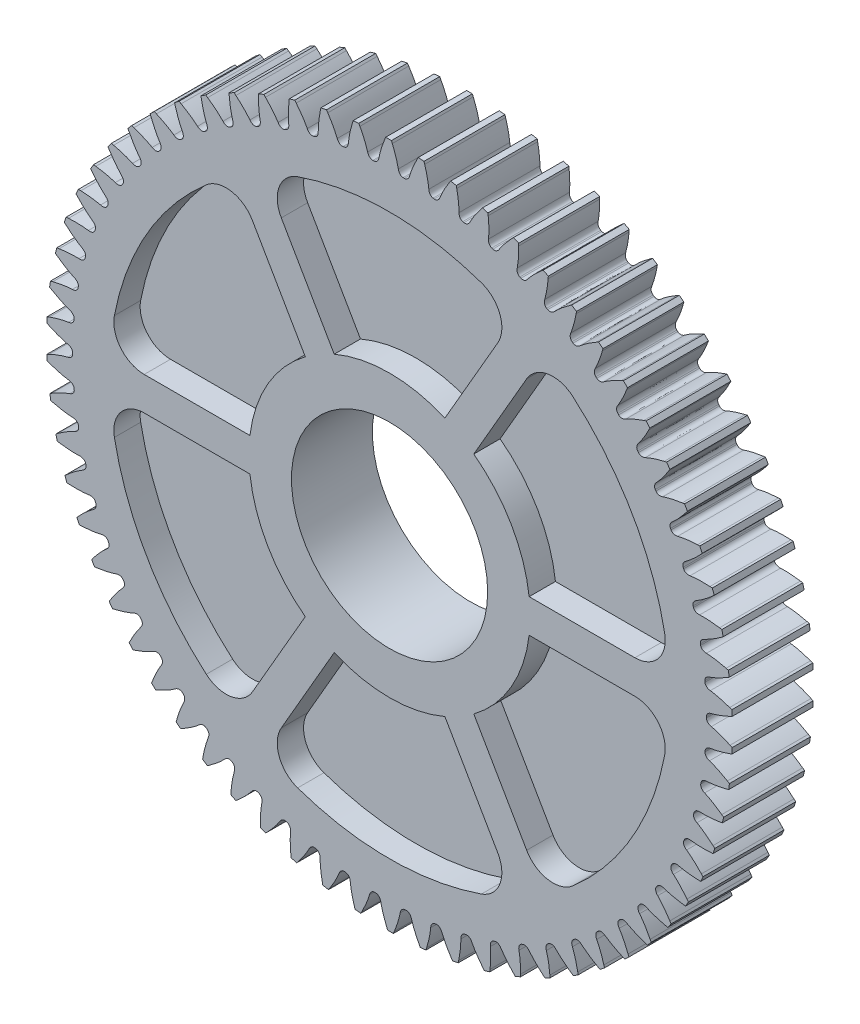
from build123d import *

# Parameters (mm, degrees)
EXTRUDE_1_DEPTH     = 2
CUT_EXTRUDE_1_DEPTH = 1.3
SKETCH_4_R          = 4.85
CUT_EXTRUDE_2_DEPTH = 25.294571249


with BuildPart() as part:
    # Эскиз1 → Бобышка-Вытянуть1 (new, symmetric)
    with BuildSketch(Plane.XY):
        with BuildLine():
            Line((-1.464490149, 16.779210875), (-1.519170703, 16.881783685))
            ThreePointArc((-1.519170703, 16.881783685), (-1.660358756, 16.868482706), (-1.801430586, 16.854000945))
            Line((-1.801430586, 16.854000945), (-1.835063118, 16.74273551))
            add(Edge.make_bspline(
                [(-2.034966327, 15.77960142), (-2.026777027, 15.859603258), (-2.016443444, 15.939267371), (-2.00396558, 16.01859376), (-1.991305613, 16.099077839), (-1.976088506, 16.179256501), (-1.959363701, 16.259003036), (-1.942398659, 16.339895056), (-1.923282348, 16.420413916), (-1.902734802, 16.500475581), (-1.88189646, 16.581670307), (-1.859339232, 16.662423617), (-1.835063118, 16.74273551)],
                knots=[0, 0, 0, 0, 1, 1, 1, 2, 2, 2, 3, 3, 3, 4, 4, 4, 4], degree=3))
            add(Edge.make_bspline(
                [(-2.034966327, 15.77960142), (-2.036976919, 15.726149627), (-2.049567096, 15.677628324), (-2.07273686, 15.634037511), (-2.085633627, 15.609773968), (-2.101592934, 15.585090647), (-2.121260667, 15.565829672), (-2.138059541, 15.549378224), (-2.15821511, 15.534513986), (-2.179302472, 15.524080765), (-2.19940439, 15.514135103), (-2.221087567, 15.50735459), (-2.244352003, 15.503739225)],
                knots=[0, 0, 0, 0, 1, 1, 1, 2, 2, 2, 3, 3, 3, 4, 4, 4, 4], degree=3))
            ThreePointArc((-2.244352003, 15.503739225), (-2.274583064, 15.499332817), (-2.304805474, 15.49486746))
            add(Edge.make_bspline(
                [(-2.584622914, 15.698937331), (-2.567339365, 15.648317023), (-2.541338946, 15.605459029), (-2.506621655, 15.570363351), (-2.487297297, 15.550828374), (-2.464918921, 15.531771246), (-2.440546431, 15.518973333), (-2.419729064, 15.508042204), (-2.396152575, 15.499595804), (-2.372956699, 15.495661308), (-2.350844801, 15.491910676), (-2.328127726, 15.49164606), (-2.304805474, 15.49486746)],
                knots=[0, 0, 0, 0, 1, 1, 1, 2, 2, 2, 3, 3, 3, 4, 4, 4, 4], degree=3))
            add(Edge.make_bspline(
                [(-2.584622914, 15.698937331), (-2.615452986, 15.773212935), (-2.648239891, 15.846548961), (-2.68298363, 15.918945409), (-2.718234419, 15.992398412), (-2.755846774, 16.064824159), (-2.794779097, 16.13640281), (-2.834270646, 16.209009621), (-2.87571554, 16.280640905), (-2.918399961, 16.351423051), (-2.961688466, 16.423206931), (-3.006496552, 16.494074137), (-3.05282422, 16.56402467)],
                knots=[0, 0, 0, 0, 1, 1, 1, 2, 2, 2, 3, 3, 3, 4, 4, 4, 4], degree=3))
            Line((-3.05282422, 16.56402467), (-3.117007342, 16.660935305))
            ThreePointArc((-3.117007342, 16.660935305), (-3.256291746, 16.634273776), (-3.395348212, 16.60644786))
            Line((-3.395348212, 16.60644786), (-3.418252002, 16.492489268))
            add(Edge.make_bspline(
                [(-3.525698317, 15.514714316), (-3.525150757, 15.595132341), (-3.522436522, 15.675417999), (-3.51755561, 15.755571288), (-3.512603467, 15.836894336), (-3.505076731, 15.91815642), (-3.496008047, 15.999131651), (-3.4868091, 16.081270015), (-3.475433153, 16.1632414), (-3.462588993, 16.244893709), (-3.449563057, 16.327701589), (-3.43478406, 16.410233442), (-3.418252002, 16.492489268)],
                knots=[0, 0, 0, 0, 1, 1, 1, 2, 2, 2, 3, 3, 3, 4, 4, 4, 4], degree=3))
            add(Edge.make_bspline(
                [(-3.525698317, 15.514714316), (-3.522618889, 15.461313438), (-3.530539815, 15.41181507), (-3.549461094, 15.366219214), (-3.559993067, 15.340839623), (-3.57353381, 15.314751041), (-3.591281614, 15.293707744), (-3.606440612, 15.275733955), (-3.625091979, 15.259021115), (-3.645092115, 15.246630655), (-3.664157615, 15.234819219), (-3.68509808, 15.226008292), (-3.70791351, 15.220197872)],
                knots=[0, 0, 0, 0, 1, 1, 1, 2, 2, 2, 3, 3, 3, 4, 4, 4, 4], degree=3))
            ThreePointArc((-3.70791351, 15.220197872), (-3.737588827, 15.212937771), (-3.767249928, 15.205619811))
            add(Edge.make_bspline(
                [(-4.065198408, 15.3821673), (-4.043181354, 15.33341911), (-4.013224755, 15.293226677), (-3.975328611, 15.261590003), (-3.954234838, 15.24398038), (-3.930146298, 15.227136744), (-3.904667649, 15.216713533), (-3.882905475, 15.207810717), (-3.858632861, 15.201643651), (-3.83516802, 15.199931879), (-3.812799726, 15.1983001), (-3.790160362, 15.200196077), (-3.767249928, 15.205619811)],
                knots=[0, 0, 0, 0, 1, 1, 1, 2, 2, 2, 3, 3, 3, 4, 4, 4, 4], degree=3))
            add(Edge.make_bspline(
                [(-4.065198408, 15.3821673), (-4.102949224, 15.453175993), (-4.1425587, 15.523063355), (-4.184026836, 15.591829384), (-4.226100159, 15.661598985), (-4.270426708, 15.730121501), (-4.315986725, 15.797675286), (-4.36220117, 15.866199417), (-4.410267385, 15.933566762), (-4.459486797, 15.999970989), (-4.509402781, 16.067314991), (-4.560744329, 16.133602026), (-4.613511441, 16.198832093)],
                knots=[0, 0, 0, 0, 1, 1, 1, 2, 2, 2, 3, 3, 3, 4, 4, 4, 4], degree=3))
            Line((-4.613511441, 16.198832093), (-4.686615879, 16.289202915))
            ThreePointArc((-4.686615879, 16.289202915), (-4.822735253, 16.249422287), (-4.958517039, 16.208504211))
            Line((-4.958517039, 16.208504211), (-4.970484666, 16.092884489))
            add(Edge.make_bspline(
                [(-4.984501038, 15.109323556), (-4.991600177, 15.189429492), (-4.996529868, 15.269609614), (-4.999290113, 15.349863923), (-5.002090641, 15.431289465), (-5.002322438, 15.51289905), (-5.000992003, 15.594369651), (-4.999642457, 15.677010502), (-4.996109897, 15.759692067), (-4.991085442, 15.842195563), (-4.985989878, 15.925866677), (-4.979122953, 16.009429652), (-4.970484666, 16.092884489)],
                knots=[0, 0, 0, 0, 1, 1, 1, 2, 2, 2, 3, 3, 3, 4, 4, 4, 4], degree=3))
            add(Edge.make_bspline(
                [(-4.984501038, 15.109323556), (-4.976359478, 15.056457199), (-4.979539418, 15.006430033), (-4.994040858, 14.959242056), (-5.002112658, 14.932976258), (-5.01311221, 14.905718678), (-5.028779358, 14.883083631), (-5.042161198, 14.863750274), (-5.059139454, 14.845340186), (-5.077871239, 14.831104697), (-5.095727661, 14.817534454), (-5.115735774, 14.806772905), (-5.137895579, 14.798820051)],
                knots=[0, 0, 0, 0, 1, 1, 1, 2, 2, 2, 3, 3, 3, 4, 4, 4, 4], degree=3))
            ThreePointArc((-5.137895579, 14.798820051), (-5.166746407, 14.788772006), (-5.195577584, 14.778667715))
            add(Edge.make_bspline(
                [(-5.508958836, 14.926093979), (-5.482407667, 14.879659379), (-5.44876618, 14.842496497), (-5.408034376, 14.814605333), (-5.385362216, 14.799080538), (-5.359781661, 14.784602933), (-5.333427592, 14.776648819), (-5.310917693, 14.769854942), (-5.28616877, 14.76602306), (-5.262647465, 14.766549513), (-5.240225346, 14.767051364), (-5.217868719, 14.771090765), (-5.195577584, 14.778667715)],
                knots=[0, 0, 0, 0, 1, 1, 1, 2, 2, 2, 3, 3, 3, 4, 4, 4, 4], degree=3))
            add(Edge.make_bspline(
                [(-5.508958836, 14.926093979), (-5.553288518, 14.993192697), (-5.599361856, 15.058998483), (-5.647178848, 15.123511337), (-5.695693682, 15.188965692), (-5.746332996, 15.252964427), (-5.798108109, 15.315881568), (-5.850626924, 15.379702455), (-5.904879164, 15.44219577), (-5.960187831, 15.503620711), (-6.016279245, 15.565914959), (-6.073689298, 15.627021517), (-6.132417989, 15.686940384)],
                knots=[0, 0, 0, 0, 1, 1, 1, 2, 2, 2, 3, 3, 3, 4, 4, 4, 4], degree=3))
            Line((-6.132417989, 15.686940384), (-6.213781697, 15.769952981))
            ThreePointArc((-6.213781697, 15.769952981), (-6.345503323, 15.717413514), (-6.476780768, 15.663773839))
            Line((-6.476780768, 15.663773839), (-6.477703851, 15.547540057))
            add(Edge.make_bspline(
                [(-6.398163346, 14.567100423), (-6.412844892, 14.646168816), (-6.425373867, 14.72551728), (-6.43575027, 14.805145814), (-6.446278106, 14.885936447), (-6.454266338, 14.967154464), (-6.460686201, 15.048382626), (-6.467198278, 15.130777555), (-6.471541096, 15.213420522), (-6.474381848, 15.296028041), (-6.477262802, 15.37980465), (-6.478370137, 15.463641988), (-6.477703851, 15.547540057)],
                knots=[0, 0, 0, 0, 1, 1, 1, 2, 2, 2, 3, 3, 3, 4, 4, 4, 4], degree=3))
            add(Edge.make_bspline(
                [(-6.398163346, 14.567100423), (-6.385033384, 14.515247353), (-6.383443541, 14.465144441), (-6.393393815, 14.416791686), (-6.398932342, 14.389877548), (-6.40729109, 14.361697818), (-6.420735698, 14.337676007), (-6.432219191, 14.317158168), (-6.447370579, 14.297217557), (-6.464664376, 14.281265958), (-6.481150008, 14.266059801), (-6.500044573, 14.253445089), (-6.521348069, 14.243421823)],
                knots=[0, 0, 0, 0, 1, 1, 1, 2, 2, 2, 3, 3, 3, 4, 4, 4, 4], degree=3))
            ThreePointArc((-6.521348069, 14.243421823), (-6.549113131, 14.230676831), (-6.576853285, 14.217877716))
            add(Edge.make_bspline(
                [(-6.902829279, 14.33484764), (-6.871984447, 14.291147148), (-6.834962735, 14.25735037), (-6.791764143, 14.233457304), (-6.767718919, 14.220157932), (-6.740878011, 14.208177468), (-6.713887189, 14.202764485), (-6.690833417, 14.198141073), (-6.665832315, 14.196679076), (-6.64246756, 14.199438988), (-6.620194674, 14.202069925), (-6.598323249, 14.208216168), (-6.576853285, 14.217877716)],
                knots=[0, 0, 0, 0, 1, 1, 1, 2, 2, 2, 3, 3, 3, 4, 4, 4, 4], degree=3))
            add(Edge.make_bspline(
                [(-6.902829279, 14.33484764), (-6.953336372, 14.397428725), (-7.005456324, 14.458556988), (-7.059189133, 14.51823243), (-7.11370612, 14.578778774), (-7.170199602, 14.637674145), (-7.227720928, 14.695384855), (-7.286068495, 14.753924525), (-7.346015444, 14.810977863), (-7.406912481, 14.866867244), (-7.468671353, 14.92354759), (-7.531629997, 14.97892028), (-7.59578841, 15.032985313)],
                knots=[0, 0, 0, 0, 1, 1, 1, 2, 2, 2, 3, 3, 3, 4, 4, 4, 4], degree=3))
            Line((-7.59578841, 15.032985313), (-7.684674546, 15.107887911))
            ThreePointArc((-7.684674546, 15.107887911), (-7.810805533, 15.04306541), (-7.936389768, 14.977189905))
            Line((-7.936389768, 14.977189905), (-7.926259948, 14.861394694))
            add(Edge.make_bspline(
                [(-7.753882896, 13.892955372), (-7.776013891, 13.970270168), (-7.796028685, 14.048068381), (-7.813927276, 14.126350011), (-7.83208708, 14.205774083), (-7.847759404, 14.285865009), (-7.861871424, 14.366115117), (-7.87618615, 14.447517943), (-7.888365017, 14.529373886), (-7.899045249, 14.61133732), (-7.909876632, 14.69446073), (-7.918948198, 14.777813188), (-7.926259948, 14.861394694)],
                knots=[0, 0, 0, 0, 1, 1, 1, 2, 2, 2, 3, 3, 3, 4, 4, 4, 4], degree=3))
            add(Edge.make_bspline(
                [(-7.753882896, 13.892955372), (-7.73588344, 13.84258518), (-7.729538211, 13.792860262), (-7.734847208, 13.743780618), (-7.737802305, 13.716461879), (-7.74344455, 13.687615199), (-7.754544861, 13.662424169), (-7.764026012, 13.640907662), (-7.777213317, 13.619617112), (-7.79291251, 13.602093864), (-7.807878057, 13.585389502), (-7.825487961, 13.571035868), (-7.845742222, 13.559032962)],
                knots=[0, 0, 0, 0, 1, 1, 1, 2, 2, 2, 3, 3, 3, 4, 4, 4, 4], degree=3))
            ThreePointArc((-7.845742222, 13.559032962), (-7.872170073, 13.543706443), (-7.898567984, 13.528328414))
            add(Edge.make_bspline(
                [(-8.234186632, 13.613782701), (-8.199327471, 13.573212076), (-8.159260808, 13.543087469), (-8.113986643, 13.52340888), (-8.088786112, 13.512455373), (-8.060927926, 13.503080549), (-8.033544783, 13.500257716), (-8.010155918, 13.49784664), (-7.985129052, 13.498767769), (-7.96213244, 13.503736145), (-7.940210493, 13.508472341), (-7.919022341, 13.516669764), (-7.898567984, 13.528328414)],
                knots=[0, 0, 0, 0, 1, 1, 1, 2, 2, 2, 3, 3, 3, 4, 4, 4, 4], degree=3))
            add(Edge.make_bspline(
                [(-8.234186632, 13.613782701), (-8.290413735, 13.67127941), (-8.348108294, 13.727176563), (-8.407270309, 13.781474161), (-8.467295735, 13.836564178), (-8.52913177, 13.889822819), (-8.591878387, 13.941804461), (-8.655526301, 13.99453277), (-8.720625071, 14.045629446), (-8.786558984, 14.095477124), (-8.853426017, 14.146030264), (-8.921363088, 14.195167622), (-8.990370195, 14.2428892)],
                knots=[0, 0, 0, 0, 1, 1, 1, 2, 2, 2, 3, 3, 3, 4, 4, 4, 4], degree=3))
            Line((-8.990370195, 14.2428892), (-9.085973792, 14.309003468))
            ThreePointArc((-9.085973792, 14.309003468), (-9.205371877, 14.232484976), (-9.324125593, 14.15497022))
            Line((-9.324125593, 14.15497022), (-9.303034607, 14.040662239))
            add(Edge.make_bspline(
                [(-9.039382081, 13.092993566), (-9.068762105, 13.16785459), (-9.09608146, 13.243397999), (-9.121340147, 13.319623794), (-9.146967459, 13.396962029), (-9.170181944, 13.475200548), (-9.191858322, 13.553745845), (-9.213846061, 13.633419372), (-9.233750683, 13.713746989), (-9.252173674, 13.794324066), (-9.270857393, 13.876041498), (-9.287811038, 13.958154223), (-9.303034607, 14.040662239)],
                knots=[0, 0, 0, 0, 1, 1, 1, 2, 2, 2, 3, 3, 3, 4, 4, 4, 4], degree=3))
            add(Edge.make_bspline(
                [(-9.039382081, 13.092993566), (-9.016676137, 13.044562411), (-9.005632985, 12.995665804), (-9.006252626, 12.946303744), (-9.006597531, 12.918827806), (-9.009472176, 12.889575417), (-9.018127665, 12.863443303), (-9.02552061, 12.841122983), (-9.036624407, 12.818675306), (-9.050586822, 12.7997391), (-9.063896753, 12.781687812), (-9.080062519, 12.765725244), (-9.099084118, 12.751851398)],
                knots=[0, 0, 0, 0, 1, 1, 1, 2, 2, 2, 3, 3, 3, 4, 4, 4, 4], degree=3))
            ThreePointArc((-9.099084118, 12.751851398), (-9.123935424, 12.734082152), (-9.148752028, 12.716264475))
            add(Edge.make_bspline(
                [(-9.490973915, 12.769429238), (-9.452416117, 12.732355894), (-9.409667353, 12.706176272), (-9.362727624, 12.690890372), (-9.336600005, 12.682381926), (-9.30797683, 12.67569764), (-9.280449353, 12.675490523), (-9.256937206, 12.675313617), (-9.232111223, 12.678609531), (-9.209691015, 12.685741376), (-9.188318537, 12.69253994), (-9.168005542, 12.702714306), (-9.148752028, 12.716264475)],
                knots=[0, 0, 0, 0, 1, 1, 1, 2, 2, 2, 3, 3, 3, 4, 4, 4, 4], degree=3))
            add(Edge.make_bspline(
                [(-9.490973915, 12.769429238), (-9.552411827, 12.821320871), (-9.615158503, 12.871480701), (-9.679213943, 12.919908728), (-9.744204208, 12.969043514), (-9.810822801, 13.016183107), (-9.878226465, 13.061964927), (-9.946598321, 13.108404359), (-10.016259366, 13.153081634), (-10.086633049, 13.196436181), (-10.158002684, 13.240404297), (-10.230302933, 13.282861328), (-10.303533795, 13.323807276)],
                knots=[0, 0, 0, 0, 1, 1, 1, 2, 2, 2, 3, 3, 3, 4, 4, 4, 4], degree=3))
            Line((-10.303533795, 13.323807276), (-10.404989053, 13.380534474))
            ThreePointArc((-10.404989053, 13.380534474), (-10.516572949, 13.293012954), (-10.627420692, 13.204560933))
            Line((-10.627420692, 13.204560933), (-10.595559543, 13.092775373))
            add(Edge.make_bspline(
                [(-10.243019222, 12.174459583), (-10.279382204, 12.246188881), (-10.313758712, 12.318793355), (-10.346148749, 12.392273003), (-10.379011485, 12.466825013), (-10.409557897, 12.542502585), (-10.438602328, 12.618631751), (-10.468063955, 12.695854443), (-10.495514072, 12.773926276), (-10.521512981, 12.852387278), (-10.547879835, 12.931958686), (-10.572562022, 13.012088051), (-10.595559543, 13.092775373)],
                knots=[0, 0, 0, 0, 1, 1, 1, 2, 2, 2, 3, 3, 3, 4, 4, 4, 4], degree=3))
            add(Edge.make_bspline(
                [(-10.243019222, 12.174459583), (-10.215812419, 12.128406065), (-10.200171353, 12.080780583), (-10.196096026, 12.031583138), (-10.193827615, 12.004198829), (-10.193908628, 11.974805644), (-10.200040909, 11.947969102), (-10.205278696, 11.925047106), (-10.214198427, 11.90164559), (-10.226297618, 11.881467918), (-10.237831397, 11.862233177), (-10.252406624, 11.844806236), (-10.2700233, 11.829187094)],
                knots=[0, 0, 0, 0, 1, 1, 1, 2, 2, 2, 3, 3, 3, 4, 4, 4, 4], degree=3))
            ThreePointArc((-10.2700233, 11.829187094), (-10.293073002, 11.809136042), (-10.316083557, 11.789040076))
            add(Edge.make_bspline(
                [(-10.661809469, 11.809433846), (-10.619902218, 11.776193525), (-10.574858492, 11.754195975), (-10.526678293, 11.743441195), (-10.499860203, 11.737454864), (-10.470731254, 11.733521651), (-10.443308736, 11.735932125), (-10.419886238, 11.737990992), (-10.395485965, 11.743631841), (-10.373845203, 11.752862569), (-10.353215746, 11.761661932), (-10.333961864, 11.773721101), (-10.316083557, 11.789040076)],
                knots=[0, 0, 0, 0, 1, 1, 1, 2, 2, 2, 3, 3, 3, 4, 4, 4, 4], degree=3))
            add(Edge.make_bspline(
                [(-10.661809469, 11.809433846), (-10.727901799, 11.855250465), (-10.795132348, 11.899218717), (-10.863501116, 11.941338602), (-10.932867658, 11.984073184), (-11.003665501, 12.024666825), (-11.075115794, 12.063834215), (-11.147592406, 12.103564209), (-11.221184865, 12.141417478), (-11.295361002, 12.177886268), (-11.370586906, 12.214871178), (-11.446595571, 12.250263385), (-11.523386998, 12.28406289)],
                knots=[0, 0, 0, 0, 1, 1, 1, 2, 2, 2, 3, 3, 3, 4, 4, 4, 4], degree=3))
            Line((-11.523386998, 12.28406289), (-11.629775121, 12.330889288))
            ThreePointArc((-11.629775121, 12.330889288), (-11.732534307, 12.233157349), (-11.834472225, 12.134569097))
            Line((-11.834472225, 12.134569097), (-11.792129452, 12.026318305))
            add(Edge.make_bspline(
                [(-11.353893996, 11.145671809), (-11.396910626, 11.21361979), (-11.438032969, 11.28262781), (-11.477261025, 11.352695868), (-11.517061576, 11.423786499), (-11.554663282, 11.496217776), (-11.590812734, 11.569241375), (-11.62748144, 11.64331389), (-11.662228461, 11.718422909), (-11.695567837, 11.794057279), (-11.729379043, 11.870762054), (-11.761566248, 11.948182396), (-11.792129452, 12.026318305)],
                knots=[0, 0, 0, 0, 1, 1, 1, 2, 2, 2, 3, 3, 3, 4, 4, 4, 4], degree=3))
            add(Edge.make_bspline(
                [(-11.353893996, 11.145671809), (-11.322432721, 11.102412996), (-11.30233539, 11.056489944), (-11.293602002, 11.007902653), (-11.288740818, 10.980857968), (-11.286027464, 10.951590177), (-11.289581002, 10.924292242), (-11.292616198, 10.900976155), (-11.299271084, 10.87683273), (-11.30939748, 10.855596322), (-11.319050655, 10.835352322), (-11.331903348, 10.816618828), (-11.347955559, 10.799395839)],
                knots=[0, 0, 0, 0, 1, 1, 1, 2, 2, 2, 3, 3, 3, 4, 4, 4, 4], degree=3))
            ThreePointArc((-11.347955559, 10.799395839), (-11.368994918, 10.777244566), (-11.389991036, 10.755052304))
            add(Edge.make_bspline(
                [(-11.736090025, 10.742490393), (-11.69121284, 10.713384124), (-11.644282076, 10.695767858), (-11.595297733, 10.689641597), (-11.568032041, 10.686231594), (-11.538661114, 10.685085073), (-11.511591897, 10.690091308), (-11.488471166, 10.694367302), (-11.464717576, 10.702302002), (-11.444052242, 10.713548018), (-11.424352629, 10.724268492), (-11.406332227, 10.738103254), (-11.389991036, 10.755052304)],
                knots=[0, 0, 0, 0, 1, 1, 1, 2, 2, 2, 3, 3, 3, 4, 4, 4, 4], degree=3))
            add(Edge.make_bspline(
                [(-11.736090025, 10.742490393), (-11.806238231, 10.781817075), (-11.877343803, 10.819195566), (-11.949406741, 10.854625863), (-12.022521367, 10.890573231), (-12.096857302, 10.924253299), (-12.17170716, 10.956451553), (-12.247632168, 10.989112306), (-12.324489577, 11.019798765), (-12.401796418, 11.049051532), (-12.480197331, 11.078718294), (-12.559226067, 11.10672516), (-12.638882624, 11.133072129)],
                knots=[0, 0, 0, 0, 1, 1, 1, 2, 2, 2, 3, 3, 3, 4, 4, 4, 4], degree=3))
            Line((-12.638882624, 11.133072129), (-12.749240145, 11.169573659))
            ThreePointArc((-12.749240145, 11.169573659), (-12.842244018, 11.062516376), (-12.934348944, 10.954684724))
            Line((-12.934348944, 10.954684724), (-12.881908011, 10.850949037))
            add(Edge.make_bspline(
                [(-12.361946147, 10.015947104), (-12.41122686, 10.079498421), (-12.458722628, 10.14428504), (-12.504433449, 10.210306961), (-12.550811373, 10.277292405), (-12.595127847, 10.345821438), (-12.638054946, 10.415078157), (-12.681598653, 10.485329684), (-12.723327903, 10.556795689), (-12.76370582, 10.628918472), (-12.804655178, 10.702061962), (-12.844055909, 10.77607215), (-12.881908011, 10.850949037)],
                knots=[0, 0, 0, 0, 1, 1, 1, 2, 2, 2, 3, 3, 3, 4, 4, 4, 4], degree=3))
            add(Edge.make_bspline(
                [(-12.361946147, 10.015947104), (-12.32651532, 9.975874755), (-12.302143727, 9.932070019), (-12.288831369, 9.884532897), (-12.281421436, 9.858072757), (-12.275938288, 9.829195414), (-12.276880901, 9.801683301), (-12.277686019, 9.778184277), (-12.282015793, 9.753517587), (-12.290077687, 9.731414765), (-12.297762836, 9.710344839), (-12.3087766, 9.690474445), (-12.323118977, 9.671803584)],
                knots=[0, 0, 0, 0, 1, 1, 1, 2, 2, 2, 3, 3, 3, 4, 4, 4, 4], degree=3))
            ThreePointArc((-12.323118977, 9.671803584), (-12.341957454, 9.647752695), (-12.360748992, 9.623665114))
            add(Edge.make_bspline(
                [(-12.704086733, 9.578261283), (-12.656646028, 9.553552657), (-12.608253238, 9.540477212), (-12.558908362, 9.539034949), (-12.531441989, 9.538232155), (-12.502095073, 9.53988271), (-12.4756243, 9.547439369), (-12.453014721, 9.553893767), (-12.43012293, 9.56405046), (-12.410620172, 9.577209918), (-12.392028806, 9.589754415), (-12.37540508, 9.60523948), (-12.360748992, 9.623665114)],
                knots=[0, 0, 0, 0, 1, 1, 1, 2, 2, 2, 3, 3, 3, 4, 4, 4, 4], degree=3))
            add(Edge.make_bspline(
                [(-12.704086733, 9.578261283), (-12.777655541, 9.61074188), (-12.851992192, 9.641192103), (-12.927096688, 9.669611952), (-13.00329726, 9.698446561), (-13.08049809, 9.724908042), (-13.158069661, 9.74984557), (-13.236755476, 9.775141301), (-13.316181803, 9.798383048), (-13.395919244, 9.820154874), (-13.476785157, 9.842234822), (-13.558118266, 9.862602711), (-13.639918571, 9.881258542)],
                knots=[0, 0, 0, 0, 1, 1, 1, 2, 2, 2, 3, 3, 3, 4, 4, 4, 4], degree=3))
            Line((-13.639918571, 9.881258542), (-13.753246076, 9.907104642))
            ThreePointArc((-13.753246076, 9.907104642), (-13.835652379, 9.791691542), (-13.917090196, 9.67559303))
            Line((-13.917090196, 9.67559303), (-13.855026015, 9.577311894))
            add(Edge.make_bspline(
                [(-13.258046599, 8.795516432), (-13.313145103, 8.854095554), (-13.366584165, 8.914074054), (-13.418363786, 8.975451933), (-13.47089908, 9.03772556), (-13.521528983, 9.10173174), (-13.570844975, 9.166594378), (-13.620869345, 9.232388709), (-13.669202918, 9.299564492), (-13.716253706, 9.367522533), (-13.763970374, 9.436442339), (-13.81022781, 9.506372126), (-13.855026015, 9.577311894)],
                knots=[0, 0, 0, 0, 1, 1, 1, 2, 2, 2, 3, 3, 3, 4, 4, 4, 4], degree=3))
            add(Edge.make_bspline(
                [(-13.258046599, 8.795516432), (-13.218967087, 8.758993448), (-13.190541946, 8.71770373), (-13.172771176, 8.671647279), (-13.1628796, 8.646011312), (-13.154676314, 8.617785934), (-13.152999466, 8.590308797), (-13.151567214, 8.566839648), (-13.153532664, 8.54187308), (-13.159457046, 8.519104008), (-13.165104574, 8.497398969), (-13.174179665, 8.476571625), (-13.18668232, 8.456621977)],
                knots=[0, 0, 0, 0, 1, 1, 1, 2, 2, 2, 3, 3, 3, 4, 4, 4, 4], degree=3))
            ThreePointArc((-13.18668232, 8.456621977), (-13.203149313, 8.430889282), (-13.219566092, 8.405124521))
            add(Edge.make_bspline(
                [(-13.557033264, 8.327289956), (-13.50745867, 8.307202738), (-13.458042106, 8.298786527), (-13.408783572, 8.302041323), (-13.381365259, 8.303853009), (-13.352308122, 8.308285692), (-13.326675518, 8.318324341), (-13.304781846, 8.326898689), (-13.282959166, 8.339185395), (-13.264795603, 8.354139121), (-13.247480851, 8.368394038), (-13.232404347, 8.385389171), (-13.219566092, 8.405124521)],
                knots=[0, 0, 0, 0, 1, 1, 1, 2, 2, 2, 3, 3, 3, 4, 4, 4, 4], degree=3))
            add(Edge.make_bspline(
                [(-13.557033264, 8.327289956), (-13.633356423, 8.352630319), (-13.710250951, 8.375876513), (-13.787716846, 8.397028538), (-13.866313279, 8.418489256), (-13.945679862, 8.437492513), (-14.025270646, 8.454943474), (-14.106004677, 8.472645103), (-14.187280624, 8.488231657), (-14.268726551, 8.502325372), (-14.35132513, 8.516618547), (-14.434226048, 8.529163006), (-14.517429303, 8.539958748)],
                knots=[0, 0, 0, 0, 1, 1, 1, 2, 2, 2, 3, 3, 3, 4, 4, 4, 4], degree=3))
            Line((-14.517429303, 8.539958748), (-14.632700481, 8.55491535))
            ThreePointArc((-14.632700481, 8.55491535), (-14.703762929, 8.432191633), (-14.773796124, 8.308877668))
            Line((-14.773796124, 8.308877668), (-14.702670759, 8.216941131))
            add(Edge.make_bspline(
                [(-14.034080128, 7.495432201), (-14.094497441, 7.548508627), (-14.153395846, 7.603135834), (-14.210775344, 7.659313822), (-14.268992238, 7.716311673), (-14.32547706, 7.775215349), (-14.38073533, 7.835096502), (-14.436787335, 7.895837792), (-14.491287514, 7.958115), (-14.544585075, 8.021292859), (-14.598636922, 8.085364834), (-14.65133215, 8.150580925), (-14.702670759, 8.216941131)],
                knots=[0, 0, 0, 0, 1, 1, 1, 2, 2, 2, 3, 3, 3, 4, 4, 4, 4], degree=3))
            add(Edge.make_bspline(
                [(-14.034080128, 7.495432201), (-13.991705841, 7.462789339), (-13.959484574, 7.424388566), (-13.937416327, 7.380229882), (-13.925132688, 7.35565025), (-13.914283554, 7.328332451), (-13.910002431, 7.301139127), (-13.90634578, 7.277912392), (-13.905929107, 7.252872046), (-13.909662326, 7.229642927), (-13.913221085, 7.207499338), (-13.920275319, 7.18590366), (-13.930825026, 7.164855892)],
                knots=[0, 0, 0, 0, 1, 1, 1, 2, 2, 2, 3, 3, 3, 4, 4, 4, 4], degree=3))
            ThreePointArc((-13.930825026, 7.164855892), (-13.944771408, 7.137674429), (-13.958664753, 7.11046582))
            add(Edge.make_bspline(
                [(-14.287205202, 7.000905401), (-14.235945675, 6.985621505), (-14.185952861, 6.981940746), (-14.137226761, 6.989863125), (-14.110104812, 6.994272884), (-14.081600602, 7.001447552), (-14.057038298, 7.013877279), (-14.036058806, 7.024493928), (-14.015502866, 7.038799377), (-13.998842992, 7.055411947), (-13.982961658, 7.071248188), (-13.969568912, 7.089599479), (-13.958664753, 7.11046582)],
                knots=[0, 0, 0, 0, 1, 1, 1, 2, 2, 2, 3, 3, 3, 4, 4, 4, 4], degree=3))
            add(Edge.make_bspline(
                [(-14.287205202, 7.000905401), (-14.365591519, 7.018876043), (-14.444347553, 7.034707687), (-14.523473305, 7.048400333), (-14.603753818, 7.06229281), (-14.684567397, 7.073665745), (-14.765456607, 7.083472102), (-14.847507716, 7.093419318), (-14.929897234, 7.101209525), (-15.012314062, 7.107497496), (-15.09589728, 7.113874456), (-15.179615242, 7.118481879), (-15.263467948, 7.121319765)],
                knots=[0, 0, 0, 0, 1, 1, 1, 2, 2, 2, 3, 3, 3, 4, 4, 4, 4], degree=3))
            Line((-15.263467948, 7.121319765), (-15.379638884, 7.12525142))
            ThreePointArc((-15.379638884, 7.12525142), (-15.438713925, 6.99632849), (-15.496708266, 6.866915822))
            Line((-15.496708266, 6.866915822), (-15.417165839, 6.782156477))
            add(Edge.make_bspline(
                [(-14.683018855, 6.127468175), (-14.748207828, 6.174561236), (-14.812032183, 6.223342438), (-14.874491919, 6.27381178), (-14.937863193, 6.325017672), (-14.999691397, 6.378285404), (-15.06039152, 6.432642778), (-15.121963543, 6.487780945), (-15.182136766, 6.544595586), (-15.241198429, 6.602421116), (-15.301095953, 6.661065013), (-15.359751757, 6.7209768), (-15.417165839, 6.782156477)],
                knots=[0, 0, 0, 0, 1, 1, 1, 2, 2, 2, 3, 3, 3, 4, 4, 4, 4], degree=3))
            add(Edge.make_bspline(
                [(-14.683018855, 6.127468175), (-14.63773354, 6.099001055), (-14.602007948, 6.06383699), (-14.575842078, 6.02197598), (-14.561277617, 5.99867528), (-14.547880888, 5.972512454), (-14.54103426, 5.94584921), (-14.535186325, 5.923075234), (-14.532391303, 5.898187881), (-14.533899549, 5.874709079), (-14.535337312, 5.852327477), (-14.540306804, 5.830159038), (-14.548808024, 5.808203763)],
                knots=[0, 0, 0, 0, 1, 1, 1, 2, 2, 2, 3, 3, 3, 4, 4, 4, 4], degree=3))
            ThreePointArc((-14.548808024, 5.808203763), (-14.560107493, 5.779819692), (-14.571351586, 5.751413639))
            add(Edge.make_bspline(
                [(-14.887989998, 5.611119563), (-14.835509751, 5.600777401), (-14.78539343, 5.601865428), (-14.737641035, 5.614383644), (-14.711061071, 5.621351541), (-14.683367926, 5.631203219), (-14.660098362, 5.645911459), (-14.640223044, 5.658474262), (-14.621120002, 5.674668901), (-14.606114691, 5.69278987), (-14.591810599, 5.71006402), (-14.580222897, 5.729605276), (-14.571351586, 5.751413639)],
                knots=[0, 0, 0, 0, 1, 1, 1, 2, 2, 2, 3, 3, 3, 4, 4, 4, 4], degree=3))
            add(Edge.make_bspline(
                [(-14.887989998, 5.611119563), (-14.967729594, 5.62155774), (-15.047633908, 5.62983146), (-15.127702941, 5.635940723), (-15.208940502, 5.642139146), (-15.290469216, 5.645778764), (-15.371924307, 5.647851709), (-15.454549425, 5.64995443), (-15.537306384, 5.649877741), (-15.619947731, 5.648303021), (-15.703758647, 5.646706016), (-15.787535491, 5.643334678), (-15.871278263, 5.638189008)],
                knots=[0, 0, 0, 0, 1, 1, 1, 2, 2, 2, 3, 3, 3, 4, 4, 4, 4], degree=3))
            Line((-15.871278263, 5.638189008), (-15.987296896, 5.631060111))
            ThreePointArc((-15.987296896, 5.631060111), (-16.033849537, 5.497105514), (-16.079279819, 5.362766124))
            Line((-16.079279819, 5.362766124), (-15.992040679, 5.285951564))
            add(Edge.make_bspline(
                [(-15.198985889, 4.704012849), (-15.268356162, 4.744696063), (-15.336528463, 4.787189488), (-15.403502792, 4.831493126), (-15.471454545, 4.876443332), (-15.538066207, 4.923592719), (-15.603658471, 4.971934045), (-15.670192908, 5.020969749), (-15.735494236, 5.0718073), (-15.79978513, 5.123756824), (-15.86498589, 5.176441555), (-15.929071073, 5.230506468), (-15.992040679, 5.285951564)],
                knots=[0, 0, 0, 0, 1, 1, 1, 2, 2, 2, 3, 3, 3, 4, 4, 4, 4], degree=3))
            add(Edge.make_bspline(
                [(-15.198985889, 4.704012849), (-15.151199657, 4.679979273), (-15.112293277, 4.648370367), (-15.082266746, 4.60918613), (-15.065553362, 4.587375379), (-15.049730359, 4.56260446), (-15.040380231, 4.536712762), (-15.032393972, 4.51459779), (-15.027245912, 4.490088812), (-15.026515527, 4.466572957), (-15.025819273, 4.444156032), (-15.028659019, 4.421615594), (-15.035034763, 4.398951641)],
                knots=[0, 0, 0, 0, 1, 1, 1, 2, 2, 2, 3, 3, 3, 4, 4, 4, 4], degree=3))
            ThreePointArc((-15.035034763, 4.398951641), (-15.04358499, 4.369622013), (-15.052078001, 4.340275765))
            add(Edge.make_bspline(
                [(-15.353946851, 4.170518557), (-15.300721153, 4.16521179), (-15.250935186, 4.17105875), (-15.204588951, 4.188059436), (-15.178791683, 4.197522368), (-15.152160396, 4.209961837), (-15.130394306, 4.22681539), (-15.111803155, 4.241210577), (-15.094326012, 4.259147744), (-15.081111153, 4.278613006), (-15.068513844, 4.297168628), (-15.058836126, 4.317722881), (-15.052078001, 4.340275765)],
                knots=[0, 0, 0, 0, 1, 1, 1, 2, 2, 2, 3, 3, 3, 4, 4, 4, 4], degree=3))
            add(Edge.make_bspline(
                [(-15.353946851, 4.170518557), (-15.434317591, 4.173329738), (-15.51464656, 4.173970607), (-15.594933756, 4.172441162), (-15.676392664, 4.170889396), (-15.757898179, 4.166762737), (-15.83918148, 4.161083497), (-15.921632342, 4.155322679), (-16.004007281, 4.147379788), (-16.086124735, 4.13795664), (-16.169404343, 4.128400132), (-16.252481373, 4.117080564), (-16.335355825, 4.103997938)],
                knots=[0, 0, 0, 0, 1, 1, 1, 2, 2, 2, 3, 3, 3, 4, 4, 4, 4], degree=3))
            Line((-16.335355825, 4.103997938), (-16.450171471, 4.085873048))
            ThreePointArc((-16.450171471, 4.085873048), (-16.483780124, 3.948099899), (-16.516234924, 3.810050385))
            Line((-16.516234924, 3.810050385), (-16.422089121, 3.741876255))
            add(Edge.make_bspline(
                [(-15.577308553, 3.237957254), (-15.650231897, 3.271862187), (-15.722134766, 3.30768301), (-15.793017159, 3.345419723), (-15.86493401, 3.383707166), (-15.935725883, 3.424311216), (-16.005616276, 3.466198707), (-16.076510579, 3.508687873), (-16.146348634, 3.553087942), (-16.21528653, 3.598690997), (-16.285200058, 3.644939441), (-16.354134255, 3.69266786), (-16.422089121, 3.741876255)],
                knots=[0, 0, 0, 0, 1, 1, 1, 2, 2, 2, 3, 3, 3, 4, 4, 4, 4], degree=3))
            add(Edge.make_bspline(
                [(-15.577308553, 3.237957254), (-15.527454165, 3.218574873), (-15.485719338, 3.190807381), (-15.452104071, 3.154654778), (-15.433393123, 3.134531495), (-15.415287142, 3.111376813), (-15.40351819, 3.086491141), (-15.393465931, 3.065235449), (-15.386011456, 3.041326804), (-15.383049054, 3.017986858), (-15.380225089, 2.995737622), (-15.38090937, 2.973029313), (-15.385101899, 2.949861932)],
                knots=[0, 0, 0, 0, 1, 1, 1, 2, 2, 2, 3, 3, 3, 4, 4, 4, 4], degree=3))
            ThreePointArc((-15.385101899, 2.949861932), (-15.390825451, 2.91985236), (-15.396490468, 2.889831682))
            add(Edge.make_bspline(
                [(-15.680855983, 2.692148689), (-15.627366855, 2.691925376), (-15.578362112, 2.702478317), (-15.533841754, 2.723807513), (-15.509060807, 2.735679782), (-15.483732555, 2.750594389), (-15.463667056, 2.769440626), (-15.446528436, 2.785537832), (-15.430835467, 2.805055087), (-15.419530737, 2.825688361), (-15.408754293, 2.845357411), (-15.401074204, 2.866738518), (-15.396490468, 2.889831682)],
                knots=[0, 0, 0, 0, 1, 1, 1, 2, 2, 2, 3, 3, 3, 4, 4, 4, 4], degree=3))
            add(Edge.make_bspline(
                [(-15.680855983, 2.692148689), (-15.761130018, 2.687307417), (-15.841156169, 2.680309629), (-15.920934436, 2.671155326), (-16.001876988, 2.661867426), (-16.082621175, 2.650011861), (-16.162996573, 2.636631868), (-16.24452649, 2.623059683), (-16.325773409, 2.607322522), (-16.406623302, 2.590136282), (-16.48861741, 2.572706817), (-16.570242268, 2.553541532), (-16.651497875, 2.532640426)],
                knots=[0, 0, 0, 0, 1, 1, 1, 2, 2, 2, 3, 3, 3, 4, 4, 4, 4], degree=3))
            Line((-16.651497875, 2.532640426), (-16.764070747, 2.503683687))
            ThreePointArc((-16.764070747, 2.503683687), (-16.784431047, 2.363339679), (-16.803616448, 2.222830239))
            Line((-16.803616448, 2.222830239), (-16.703416581, 2.163913935))
            add(Edge.make_bspline(
                [(-15.814560698, 1.742578216), (-15.890376709, 1.769397821), (-15.965358982, 1.798221642), (-16.039507516, 1.82904968), (-16.114738175, 1.860327623), (-16.189069157, 1.89401862), (-16.26262474, 1.929072937), (-16.337236881, 1.964630777), (-16.410979199, 2.00219127), (-16.483939784, 2.041034867), (-16.557932933, 2.080428191), (-16.631091865, 2.12138788), (-16.703416581, 2.163913935)],
                knots=[0, 0, 0, 0, 1, 1, 1, 2, 2, 2, 3, 3, 3, 4, 4, 4, 4], degree=3))
            add(Edge.make_bspline(
                [(-15.814560698, 1.742578216), (-15.763089643, 1.728022562), (-15.718904326, 1.704347951), (-15.682004749, 1.671554383), (-15.661465685, 1.653300808), (-15.641240697, 1.631972056), (-15.627159503, 1.608317778), (-15.615132279, 1.588113862), (-15.605438897, 1.56502207), (-15.600271306, 1.542069403), (-15.595345204, 1.520189348), (-15.593867825, 1.497518819), (-15.59583917, 1.474057817)],
                knots=[0, 0, 0, 0, 1, 1, 1, 2, 2, 2, 3, 3, 3, 4, 4, 4, 4], degree=3))
            ThreePointArc((-15.59583917, 1.474057817), (-15.598684214, 1.443640072), (-15.601469932, 1.413216836))
            add(Edge.make_bspline(
                [(-15.865756855, 1.189398306), (-15.812488703, 1.194260469), (-15.764708978, 1.209423823), (-15.72241768, 1.234888367), (-15.698877474, 1.249062456), (-15.675081635, 1.266317133), (-15.656898442, 1.286985379), (-15.641367564, 1.304638825), (-15.627600887, 1.325559416), (-15.618308663, 1.347173843), (-15.609450678, 1.367778197), (-15.603837768, 1.389792528), (-15.601469932, 1.413216836)],
                knots=[0, 0, 0, 0, 1, 1, 1, 2, 2, 2, 3, 3, 3, 4, 4, 4, 4], degree=3))
            add(Edge.make_bspline(
                [(-15.865756855, 1.189398306), (-15.945207211, 1.176948423), (-16.024205816, 1.162375353), (-16.102752669, 1.145679095), (-16.182445835, 1.128739172), (-16.261697463, 1.109262067), (-16.340437066, 1.088302492), (-16.420307691, 1.067041852), (-16.499690806, 1.04365294), (-16.578540948, 1.01885925), (-16.658507005, 0.993714671), (-16.737940482, 0.966877231), (-16.816841381, 0.938346931)],
                knots=[0, 0, 0, 0, 1, 1, 1, 2, 2, 2, 3, 3, 3, 4, 4, 4, 4], degree=3))
            Line((-16.816841381, 0.938346931), (-16.926152001, 0.898820579))
            ThreePointArc((-16.926152001, 0.898820579), (-16.933079562, 0.75717669), (-16.938821819, 0.615479799))
            Line((-16.938821819, 0.615479799), (-16.833475314, 0.566354875))
            add(Edge.make_bspline(
                [(-15.908593734, 0.231418121), (-15.986615809, 0.250909514), (-16.063998434, 0.272475301), (-16.14074161, 0.296115481), (-16.218604776, 0.320100666), (-16.295801715, 0.346573498), (-16.372356357, 0.374477184), (-16.450010636, 0.40278168), (-16.526989395, 0.433162444), (-16.603311927, 0.464894809), (-16.680714603, 0.497076261), (-16.757435732, 0.530896283), (-16.833475314, 0.566354875)],
                knots=[0, 0, 0, 0, 1, 1, 1, 2, 2, 2, 3, 3, 3, 4, 4, 4, 4], degree=3))
            add(Edge.make_bspline(
                [(-15.908593734, 0.231418121), (-15.85597214, 0.22182101), (-15.809736483, 0.202453681), (-15.769886763, 0.173316133), (-15.747705589, 0.157097574), (-15.725544755, 0.137787907), (-15.709278839, 0.11557924), (-15.695385572, 0.096610069), (-15.683541067, 0.074544253), (-15.676215085, 0.052186729), (-15.669231458, 0.030874004), (-15.665605798, 0.008446563), (-15.665338107, -0.015095595)],
                knots=[0, 0, 0, 0, 1, 1, 1, 2, 2, 2, 3, 3, 3, 4, 4, 4, 4], degree=3))
            ThreePointArc((-15.665338107, -0.015095595), (-15.665278878, -0.045646045), (-15.665160069, -0.076196321))
            add(Edge.make_bspline(
                [(-15.906974977, -0.324123452), (-15.854410205, -0.314219846), (-15.808288198, -0.294583401), (-15.768608958, -0.265214119), (-15.746522677, -0.248866572), (-15.724474748, -0.229428088), (-15.708338532, -0.207125007), (-15.694556046, -0.188075193), (-15.682840334, -0.165940727), (-15.675644767, -0.143540889), (-15.668785461, -0.122187828), (-15.665290561, -0.099739639), (-15.665160069, -0.076196321)],
                knots=[0, 0, 0, 0, 1, 1, 1, 2, 2, 2, 3, 3, 3, 4, 4, 4, 4], degree=3))
            add(Edge.make_bspline(
                [(-15.906974977, -0.324123452), (-15.984882139, -0.344069197), (-16.062137773, -0.366085575), (-16.13874188, -0.390172584), (-16.216463947, -0.414611118), (-16.293505301, -0.441533376), (-16.369896031, -0.469882719), (-16.447384043, -0.498639275), (-16.524184448, -0.529468125), (-16.60032076, -0.56164473), (-16.67753458, -0.59427671), (-16.754057316, -0.628543259), (-16.829888968, -0.664444379)],
                knots=[0, 0, 0, 0, 1, 1, 1, 2, 2, 2, 3, 3, 3, 4, 4, 4, 4], degree=3))
            Line((-16.829888968, -0.664444379), (-16.934947402, -0.714182388))
            ThreePointArc((-16.934947402, -0.714182388), (-16.928379487, -0.855843409), (-16.920626597, -0.997444521))
            Line((-16.920626597, -0.997444521), (-16.811087488, -1.036333182))
            add(Edge.make_bspline(
                [(-15.85855608, -1.281837734), (-15.93807764, -1.269851068), (-16.01715983, -1.255738619), (-16.095802648, -1.239500386), (-16.175593181, -1.223025173), (-16.254956968, -1.204010247), (-16.333817379, -1.183509893), (-16.413810547, -1.162715069), (-16.493328615, -1.139789169), (-16.572321906, -1.115455409), (-16.652433138, -1.090777268), (-16.732021665, -1.064403193), (-16.811087488, -1.036333182)],
                knots=[0, 0, 0, 0, 1, 1, 1, 2, 2, 2, 3, 3, 3, 4, 4, 4, 4], degree=3))
            add(Edge.make_bspline(
                [(-15.85855608, -1.281837734), (-15.805260498, -1.286389387), (-15.757393218, -1.301274041), (-15.71495424, -1.326491695), (-15.691331833, -1.34052836), (-15.667435844, -1.357644071), (-15.649132513, -1.378206001), (-15.633499021, -1.395768639), (-15.619610661, -1.416608648), (-15.610192634, -1.438168557), (-15.601214725, -1.45872094), (-15.595473619, -1.480702187), (-15.592969315, -1.504112298)],
                knots=[0, 0, 0, 0, 1, 1, 1, 2, 2, 2, 3, 3, 3, 4, 4, 4, 4], degree=3))
            ThreePointArc((-15.592969315, -1.504112298), (-15.59000635, -1.534518783), (-15.586984091, -1.564919432))
            add(Edge.make_bspline(
                [(-15.80413707, -1.834709898), (-15.752751713, -1.819854537), (-15.708705113, -1.795922833), (-15.671997271, -1.762914785), (-15.651564931, -1.744541827), (-15.631464582, -1.723095572), (-15.617521475, -1.699359636), (-15.605612197, -1.679085973), (-15.596053549, -1.655938084), (-15.591019805, -1.632955692), (-15.586221295, -1.611047301), (-15.584876057, -1.588368548), (-15.586984091, -1.564919432)],
                knots=[0, 0, 0, 0, 1, 1, 1, 2, 2, 2, 3, 3, 3, 4, 4, 4, 4], degree=3))
            add(Edge.make_bspline(
                [(-15.80413707, -1.834709898), (-15.879795498, -1.861970874), (-15.954608523, -1.891231175), (-16.028576145, -1.922490799), (-16.10362325, -1.954206626), (-16.177756632, -1.988330224), (-16.251106682, -2.0238126), (-16.325510338, -2.059804647), (-16.399032516, -2.097794245), (-16.471765496, -2.137062368), (-16.545527819, -2.176886228), (-16.618446812, -2.218271564), (-16.690522474, -2.261218378)],
                knots=[0, 0, 0, 0, 1, 1, 1, 2, 2, 2, 3, 3, 3, 4, 4, 4, 4], degree=3))
            Line((-16.690522474, -2.261218378), (-16.790377297, -2.320717609))
            ThreePointArc((-16.790377297, -2.320717609), (-16.770373386, -2.461112857), (-16.74919556, -2.60133583))
            Line((-16.74919556, -2.60133583), (-16.636455851, -2.629636046))
            add(Edge.make_bspline(
                [(-15.664900887, -2.783485067), (-15.745201773, -2.779111683), (-15.825267345, -2.772580376), (-15.905097605, -2.763891146), (-15.986092908, -2.755075106), (-16.066904814, -2.743690289), (-16.147356822, -2.73077892), (-16.228964448, -2.717682092), (-16.310301697, -2.702418674), (-16.391250372, -2.685703889), (-16.47334466, -2.66875255), (-16.55507982, -2.650063269), (-16.636455851, -2.629636046)],
                knots=[0, 0, 0, 0, 1, 1, 1, 2, 2, 2, 3, 3, 3, 4, 4, 4, 4], degree=3))
            add(Edge.make_bspline(
                [(-15.664900887, -2.783485067), (-15.611413969, -2.782950042), (-15.56234856, -2.793217223), (-15.517704659, -2.814286609), (-15.492854945, -2.826014262), (-15.467440207, -2.840781013), (-15.44726522, -2.859509996), (-15.430033083, -2.875507051), (-15.414226641, -2.894932522), (-15.40280186, -2.915499565), (-15.391910976, -2.935105481), (-15.384106416, -2.956441469), (-15.379388179, -2.979507528)],
                knots=[0, 0, 0, 0, 1, 1, 1, 2, 2, 2, 3, 3, 3, 4, 4, 4, 4], degree=3))
            ThreePointArc((-15.379388179, -2.979507528), (-15.37354831, -3.009494682), (-15.367649971, -3.03947039))
            add(Edge.make_bspline(
                [(-15.55817445, -3.328680927), (-15.508433861, -3.309008344), (-15.466861561, -3.280998108), (-15.43345755, -3.244650221), (-15.41486419, -3.22441824), (-15.396893453, -3.201158436), (-15.385269725, -3.176204602), (-15.375341508, -3.154890691), (-15.368026489, -3.13093901), (-15.365200153, -3.107582196), (-15.362505896, -3.085316881), (-15.363322502, -3.062612945), (-15.367649971, -3.03947039)],
                knots=[0, 0, 0, 0, 1, 1, 1, 2, 2, 2, 3, 3, 3, 4, 4, 4, 4], degree=3))
            add(Edge.make_bspline(
                [(-15.55817445, -3.328680927), (-15.630898971, -3.363010255), (-15.702591868, -3.399249492), (-15.773253142, -3.43739864), (-15.844945647, -3.476104536), (-15.915499693, -3.517120446), (-15.985144795, -3.55941452), (-16.055790284, -3.60231611), (-16.125368406, -3.647122415), (-16.194039374, -3.693126439), (-16.263682197, -3.739781527), (-16.33233708, -3.787910859), (-16.400004024, -3.837514433)],
                knots=[0, 0, 0, 0, 1, 1, 1, 2, 2, 2, 3, 3, 3, 4, 4, 4, 4], degree=3))
            Line((-16.400004024, -3.837514433), (-16.493750935, -3.906236051))
            ThreePointArc((-16.493750935, -3.906236051), (-16.460492186, -4.044094087), (-16.426081214, -4.181669038))
            Line((-16.426081214, -4.181669038), (-16.311161893, -4.199124518))
            add(Edge.make_bspline(
                [(-15.329381926, -4.259924728), (-15.409734919, -4.263204232), (-15.490058789, -4.264313216), (-15.570353535, -4.26325168), (-15.651820103, -4.262174652), (-15.733348282, -4.258523047), (-15.8146633, -4.253317591), (-15.897146333, -4.248037364), (-15.979566162, -4.240574658), (-16.061737136, -4.231630219), (-16.145071022, -4.222559195), (-16.228212608, -4.211723961), (-16.311161893, -4.199124518)],
                knots=[0, 0, 0, 0, 1, 1, 1, 2, 2, 2, 3, 3, 3, 4, 4, 4, 4], degree=3))
            add(Edge.make_bspline(
                [(-15.329381926, -4.259924728), (-15.276188058, -4.254307871), (-15.226368863, -4.259864598), (-15.179924341, -4.276594907), (-15.154072365, -4.285907342), (-15.127369037, -4.298191403), (-15.105505101, -4.314917825), (-15.086830376, -4.329204425), (-15.069248999, -4.347039438), (-15.055920928, -4.366427358), (-15.043215698, -4.384909252), (-15.033418362, -4.405406758), (-15.026528922, -4.427919876)],
                knots=[0, 0, 0, 0, 1, 1, 1, 2, 2, 2, 3, 3, 3, 4, 4, 4, 4], degree=3))
            ThreePointArc((-15.026528922, -4.427919876), (-15.017865036, -4.457216131), (-15.009144033, -4.486495434))
            add(Edge.make_bspline(
                [(-15.171314593, -4.792506907), (-15.123669232, -4.768195258), (-15.084947716, -4.736360157), (-15.055150047, -4.697001603), (-15.038564051, -4.675093822), (-15.022885672, -4.650231114), (-15.013686591, -4.624285367), (-15.005829345, -4.60212423), (-15.000824201, -4.577585667), (-15.00023087, -4.554065955), (-14.999665265, -4.531645353), (-15.00263632, -4.509121846), (-15.009144033, -4.486495434)],
                knots=[0, 0, 0, 0, 1, 1, 1, 2, 2, 2, 3, 3, 3, 4, 4, 4, 4], degree=3))
            add(Edge.make_bspline(
                [(-15.171314593, -4.792506907), (-15.240446602, -4.833593693), (-15.30837011, -4.87648368), (-15.375085117, -4.921176866), (-15.442773763, -4.966522306), (-15.509109525, -5.01405908), (-15.574418961, -5.062781832), (-15.640666506, -5.11220444), (-15.705670464, -5.16342168), (-15.769657523, -5.215744984), (-15.83455015, -5.268808786), (-15.898319175, -5.323246246), (-15.960964598, -5.379057363)],
                knots=[0, 0, 0, 0, 1, 1, 1, 2, 2, 2, 3, 3, 3, 4, 4, 4, 4], degree=3))
            Line((-15.960964598, -5.379057363), (-16.047754611, -5.456379015))
            ThreePointArc((-16.047754611, -5.456379015), (-16.001542221, -5.590451374), (-15.954209733, -5.724132404))
            Line((-15.954209733, -5.724132404), (-15.838151527, -5.730585068))
            add(Edge.make_bspline(
                [(-14.855037709, -5.697785851), (-14.934715121, -5.708688542), (-15.014569862, -5.717427774), (-15.094601933, -5.724003546), (-15.175801992, -5.730675285), (-15.257308112, -5.73478996), (-15.338749739, -5.737337559), (-15.4213612, -5.739921752), (-15.504117201, -5.740327341), (-15.586766321, -5.73923425), (-15.670585121, -5.73812569), (-15.754380189, -5.73524263), (-15.838151527, -5.730585068)],
                knots=[0, 0, 0, 0, 1, 1, 1, 2, 2, 2, 3, 3, 3, 4, 4, 4, 4], degree=3))
            add(Edge.make_bspline(
                [(-14.855037709, -5.697785851), (-14.802618623, -5.68713803), (-14.752496812, -5.687933979), (-14.704672277, -5.7001737), (-14.678052158, -5.70698658), (-14.650302071, -5.716676706), (-14.626947189, -5.73124909), (-14.606998996, -5.743695854), (-14.587801903, -5.759778892), (-14.572691244, -5.777812109), (-14.558286728, -5.795002607), (-14.546585344, -5.814476002), (-14.537587092, -5.836232296)],
                knots=[0, 0, 0, 0, 1, 1, 1, 2, 2, 2, 3, 3, 3, 4, 4, 4, 4], degree=3))
            ThreePointArc((-14.537587092, -5.836232296), (-14.526177651, -5.86457234), (-14.514712962, -5.89289008))
            add(Edge.make_bspline(
                [(-14.647060962, -6.212931201), (-14.601942311, -6.184200659), (-14.566422249, -6.148828995), (-14.540500774, -6.106816211), (-14.526072348, -6.083431031), (-14.512828313, -6.057190578), (-14.506137185, -6.030487887), (-14.500422067, -6.007680219), (-14.497772126, -5.982777), (-14.499417172, -5.959307386), (-14.500985343, -5.936934543), (-14.506083939, -5.914795441), (-14.514712962, -5.89289008)],
                knots=[0, 0, 0, 0, 1, 1, 1, 2, 2, 2, 3, 3, 3, 4, 4, 4, 4], degree=3))
            add(Edge.make_bspline(
                [(-14.647060962, -6.212931201), (-14.711974388, -6.260403359), (-14.775513381, -6.309555676), (-14.83767794, -6.360388153), (-14.900749729, -6.41196248), (-14.962266459, -6.465589619), (-15.022648777, -6.520299807), (-15.08389843, -6.575795856), (-15.143739537, -6.632960198), (-15.202463212, -6.691128936), (-15.262017964, -6.750120897), (-15.320323629, -6.81037349), (-15.377380204, -6.871886717)],
                knots=[0, 0, 0, 0, 1, 1, 1, 2, 2, 2, 3, 3, 3, 4, 4, 4, 4], degree=3))
            Line((-15.377380204, -6.871886717), (-15.456427335, -6.957108165))
            ThreePointArc((-15.456427335, -6.957108165), (-15.397679811, -7.086180667), (-15.337854459, -7.214757141))
            Line((-15.337854459, -7.214757141), (-15.221708408, -7.210148552))
            add(Edge.make_bspline(
                [(-14.246163969, -7.084046943), (-14.324444229, -7.102474086), (-14.403106665, -7.118764422), (-14.482151277, -7.13291795), (-14.562349467, -7.147278035), (-14.643095397, -7.159121728), (-14.723926085, -7.16939931), (-14.805917832, -7.17982452), (-14.888260553, -7.18809473), (-14.970639337, -7.194862888), (-15.054183974, -7.201726831), (-15.137873664, -7.206822052), (-15.221708408, -7.210148552)],
                knots=[0, 0, 0, 0, 1, 1, 1, 2, 2, 2, 3, 3, 3, 4, 4, 4, 4], degree=3))
            add(Edge.make_bspline(
                [(-14.246163969, -7.084046943), (-14.194994381, -7.068464585), (-14.145023866, -7.06449255), (-14.096252425, -7.072130837), (-14.069105238, -7.076382465), (-14.0405597, -7.083390899), (-14.015925378, -7.095677275), (-13.994884372, -7.106171484), (-13.974245415, -7.120356897), (-13.957489012, -7.136872098), (-13.94151566, -7.15261552), (-13.928016197, -7.170888451), (-13.916990622, -7.191690892)],
                knots=[0, 0, 0, 0, 1, 1, 1, 2, 2, 2, 3, 3, 3, 4, 4, 4, 4], degree=3))
            ThreePointArc((-13.916990622, -7.191690892), (-13.902938951, -7.218818075), (-13.888834403, -7.245917802))
            add(Edge.make_bspline(
                [(-13.990161278, -7.577090229), (-13.947977941, -7.54420098), (-13.915981006, -7.505613085), (-13.894170474, -7.461326546), (-13.882030284, -7.436675747), (-13.871340532, -7.409295187), (-13.867217955, -7.382077376), (-13.863696723, -7.358829726), (-13.863425982, -7.333787377), (-13.867294508, -7.310580408), (-13.870982251, -7.288457934), (-13.878162217, -7.266903732), (-13.888834403, -7.245917802)],
                knots=[0, 0, 0, 0, 1, 1, 1, 2, 2, 2, 3, 3, 3, 4, 4, 4, 4], degree=3))
            add(Edge.make_bspline(
                [(-13.990161278, -7.577090229), (-14.050268256, -7.630517842), (-14.108847314, -7.685487359), (-14.165898453, -7.74199878), (-14.223782197, -7.799334929), (-14.279922791, -7.858566777), (-14.334831159, -7.918768937), (-14.390528235, -7.979835845), (-14.44466456, -8.042429602), (-14.497593039, -8.105916987), (-14.551270581, -8.170302867), (-14.60358486, -8.235824938), (-14.654535875, -8.3024832)],
                knots=[0, 0, 0, 0, 1, 1, 1, 2, 2, 2, 3, 3, 3, 4, 4, 4, 4], degree=3))
            Line((-14.654535875, -8.3024832), (-14.725124261, -8.394832667))
            ThreePointArc((-14.725124261, -8.394832667), (-14.654373628, -8.517736411), (-14.582597199, -8.64004392))
            Line((-14.582597199, -8.64004392), (-14.467415141, -8.624415815))
            add(Edge.make_bspline(
                [(-13.508274763, -8.406153809), (-13.584448952, -8.431938524), (-13.661206704, -8.455632436), (-13.738548018, -8.477235544), (-13.817018051, -8.499153928), (-13.896272542, -8.51861938), (-13.975760277, -8.53653387), (-14.056389779, -8.554705686), (-14.137573513, -8.57076562), (-14.218935925, -8.585333733), (-14.301449806, -8.600108018), (-14.384276211, -8.613135379), (-14.467415141, -8.624415815)],
                knots=[0, 0, 0, 0, 1, 1, 1, 2, 2, 2, 3, 3, 3, 4, 4, 4, 4], degree=3))
            add(Edge.make_bspline(
                [(-13.508274763, -8.406153809), (-13.458818071, -8.385778031), (-13.409451393, -8.377073982), (-13.360174727, -8.380041662), (-13.332746322, -8.381693534), (-13.303663847, -8.385956808), (-13.277973176, -8.395845909), (-13.256029908, -8.404292524), (-13.234135996, -8.416451847), (-13.215885598, -8.431299469), (-13.198488067, -8.445453239), (-13.183312778, -8.462360224), (-13.17035973, -8.482020422)],
                knots=[0, 0, 0, 0, 1, 1, 1, 2, 2, 2, 3, 3, 3, 4, 4, 4, 4], degree=3))
            ThreePointArc((-13.17035973, -8.482020422), (-13.153793084, -8.507689074), (-13.137176409, -8.533325369))
            add(Edge.make_bspline(
                [(-13.206564528, -8.872629954), (-13.167698521, -8.835879849), (-13.139514484, -8.794425181), (-13.122012416, -8.748265952), (-13.112270404, -8.722572775), (-13.104231744, -8.694300071), (-13.102715052, -8.666813628), (-13.101419593, -8.643336531), (-13.103530505, -8.618381841), (-13.109587477, -8.595647681), (-13.115361397, -8.573975922), (-13.124557708, -8.553201818), (-13.137176409, -8.533325369)],
                knots=[0, 0, 0, 0, 1, 1, 1, 2, 2, 2, 3, 3, 3, 4, 4, 4, 4], degree=3))
            add(Edge.make_bspline(
                [(-13.206564528, -8.872629954), (-13.261320719, -8.931529174), (-13.314409342, -8.991818079), (-13.365830397, -9.053496667), (-13.418001891, -9.116075393), (-13.468257931, -9.180375537), (-13.517195091, -9.245524469), (-13.566835187, -9.311609206), (-13.614776464, -9.379065518), (-13.661430419, -9.447296599), (-13.708744638, -9.51649331), (-13.754593765, -9.58669148), (-13.798977799, -9.65789111)],
                knots=[0, 0, 0, 0, 1, 1, 1, 2, 2, 2, 3, 3, 3, 4, 4, 4, 4], degree=3))
            Line((-13.798977799, -9.65789111), (-13.86046818, -9.756532264))
            ThreePointArc((-13.86046818, -9.756532264), (-13.778355168, -9.872154215), (-13.695277681, -9.987085123))
            Line((-13.695277681, -9.987085123), (-13.582102721, -9.960579033))
            add(Edge.make_bspline(
                [(-12.648052528, -9.652133245), (-12.721430802, -9.685042022), (-12.795588739, -9.715924934), (-12.870526339, -9.74478198), (-12.94655758, -9.774060167), (-13.023602891, -9.800971097), (-13.101027819, -9.826360258), (-13.179564884, -9.852114111), (-13.258854417, -9.87581833), (-13.338463627, -9.898054466), (-13.419199494, -9.920605295), (-13.500412525, -9.941446817), (-13.582102721, -9.960579033)],
                knots=[0, 0, 0, 0, 1, 1, 1, 2, 2, 2, 3, 3, 3, 4, 4, 4, 4], degree=3))
            add(Edge.make_bspline(
                [(-12.648052528, -9.652133245), (-12.600756621, -9.627148572), (-12.552440851, -9.613791334), (-12.503105218, -9.612061532), (-12.475643991, -9.611098688), (-12.446287954, -9.612578193), (-12.419773593, -9.619980462), (-12.397126784, -9.626302989), (-12.374176192, -9.636326106), (-12.354597077, -9.649371686), (-12.335932922, -9.661807626), (-12.319219237, -9.677195552), (-12.304456021, -9.695535462)],
                knots=[0, 0, 0, 0, 1, 1, 1, 2, 2, 2, 3, 3, 3, 4, 4, 4, 4], degree=3))
            ThreePointArc((-12.304456021, -9.695535462), (-12.285524429, -9.719513125), (-12.266546112, -9.743453821))
            add(Edge.make_bspline(
                [(-12.303367084, -10.087817768), (-12.268170385, -10.047539622), (-12.244054484, -10.003593601), (-12.23101938, -9.955979706), (-12.223763773, -9.929476834), (-12.218449004, -9.900568027), (-12.219551932, -9.873061875), (-12.220493979, -9.849567942), (-12.224967427, -9.824926903), (-12.233157991, -9.802871438), (-12.240965798, -9.781846656), (-12.252095172, -9.762040784), (-12.266546112, -9.743453821)],
                knots=[0, 0, 0, 0, 1, 1, 1, 2, 2, 2, 3, 3, 3, 4, 4, 4, 4], degree=3))
            add(Edge.make_bspline(
                [(-12.303367084, -10.087817768), (-12.352276608, -10.151655195), (-12.399394017, -10.216717501), (-12.444719311, -10.283004686), (-12.490706083, -10.350259266), (-12.534622442, -10.419045395), (-12.57714521, -10.488551101), (-12.620278779, -10.559055191), (-12.661590844, -10.630763165), (-12.70154777, -10.70312003), (-12.742070181, -10.776500915), (-12.781038939, -10.850739459), (-12.818454044, -10.925835663)],
                knots=[0, 0, 0, 0, 1, 1, 1, 2, 2, 2, 3, 3, 3, 4, 4, 4, 4], degree=3))
            Line((-12.818454044, -10.925835663), (-12.870289554, -11.029875194))
            ThreePointArc((-12.870289554, -11.029875194), (-12.777557791, -11.137168262), (-12.683931607, -11.243681736))
            Line((-12.683931607, -11.243681736), (-12.573788677, -11.206537704))
            add(Edge.make_bspline(
                [(-11.673287571, -10.810701467), (-11.743205404, -10.850436279), (-11.814091941, -10.88822851), (-11.885947182, -10.924078162), (-11.958851078, -10.960451004), (-12.032989476, -10.994563701), (-12.107650424, -11.027197606), (-12.183383808, -11.060300266), (-12.260061083, -11.0914341), (-12.337196137, -11.121136885), (-12.415422833, -11.151260034), (-12.494287013, -11.179726974), (-12.573788677, -11.206537704)],
                knots=[0, 0, 0, 0, 1, 1, 1, 2, 2, 2, 3, 3, 3, 4, 4, 4, 4], degree=3))
            add(Edge.make_bspline(
                [(-11.673287571, -10.810701467), (-11.628580768, -10.781334165), (-11.581753462, -10.763444704), (-11.532805653, -10.757033084), (-11.505560296, -10.753464244), (-11.476196549, -10.752146581), (-11.449098617, -10.756994982), (-11.42595336, -10.761136165), (-11.402153933, -10.768932303), (-11.381423412, -10.780057698), (-11.361661659, -10.790663187), (-11.343560939, -10.804392698), (-11.327121253, -10.821246231)],
                knots=[0, 0, 0, 0, 1, 1, 1, 2, 2, 2, 3, 3, 3, 4, 4, 4, 4], degree=3))
            ThreePointArc((-11.327121253, -10.821246231), (-11.305996163, -10.843315759), (-11.284828073, -10.865344046))
            add(Edge.make_bspline(
                [(-11.288748443, -11.211648742), (-11.257539799, -11.16820732), (-11.237710431, -11.122167928), (-11.229260339, -11.073530567), (-11.224556845, -11.046458012), (-11.222014098, -11.017174906), (-11.225726657, -10.989898143), (-11.22889768, -10.966600141), (-11.235693151, -10.942495907), (-11.245943133, -10.921318872), (-11.255714118, -10.901131472), (-11.268675765, -10.882473196), (-11.284828073, -10.865344046)],
                knots=[0, 0, 0, 0, 1, 1, 1, 2, 2, 2, 3, 3, 3, 4, 4, 4, 4], degree=3))
            add(Edge.make_bspline(
                [(-11.288748443, -11.211648742), (-11.331368367, -11.279846255), (-11.37208786, -11.349092748), (-11.41090692, -11.419388222), (-11.450292505, -11.490709589), (-11.487471471, -11.563358764), (-11.523194756, -11.636591789), (-11.559431172, -11.710876738), (-11.593739896, -11.786186973), (-11.626637937, -11.862014349), (-11.660001563, -11.93891486), (-11.691737045, -12.016521462), (-11.721844384, -12.094834155)],
                knots=[0, 0, 0, 0, 1, 1, 1, 2, 2, 2, 3, 3, 3, 4, 4, 4, 4], degree=3))
            Line((-11.721844384, -12.094834155), (-11.763555592, -12.203329866))
            ThreePointArc((-11.763555592, -12.203329866), (-11.661044871, -12.301322389), (-11.557717885, -12.398453827))
            Line((-11.557717885, -12.398453827), (-11.451604455, -12.351008235))
            add(Edge.make_bspline(
                [(-10.592807514, -11.871366302), (-10.65863172, -11.917567305), (-10.725604897, -11.961926604), (-10.793727046, -12.0044442), (-10.862843369, -12.047582299), (-10.933403445, -12.088587834), (-11.004624273, -12.128170944), (-11.076868122, -12.168322629), (-11.150238737, -12.206604125), (-11.224201088, -12.243504566), (-11.29921018, -12.280927236), (-11.375011302, -12.316761792), (-11.451604455, -12.351008235)],
                knots=[0, 0, 0, 0, 1, 1, 1, 2, 2, 2, 3, 3, 3, 4, 4, 4, 4], degree=3))
            add(Edge.make_bspline(
                [(-10.592807514, -11.871366302), (-10.551094687, -11.837882326), (-10.50617992, -11.815622651), (-10.458063213, -11.804587279), (-10.431280465, -11.798444763), (-10.402174931, -11.794341865), (-10.374738832, -11.79659249), (-10.351304733, -11.798514824), (-10.326872002, -11.804013382), (-10.305177814, -11.813117839), (-10.284497428, -11.821796832), (-10.265173597, -11.833743592), (-10.247206321, -11.848958119)],
                knots=[0, 0, 0, 0, 1, 1, 1, 2, 2, 2, 3, 3, 3, 4, 4, 4, 4], degree=3))
            ThreePointArc((-10.247206321, -11.848958119), (-10.224079044, -11.868919646), (-10.200912883, -11.888836033))
            add(Edge.make_bspline(
                [(-10.171897147, -12.23394529), (-10.144959188, -12.187734003), (-10.129595932, -12.14001818), (-10.125807378, -12.090797821), (-10.123698591, -12.063400757), (-10.123950894, -12.034008543), (-10.130239464, -12.007208193), (-10.135610744, -11.98431711), (-10.144666698, -11.960967973), (-10.156883272, -11.940861152), (-10.168528948, -11.921693953), (-10.183205485, -11.904352247), (-10.200912883, -11.888836033)],
                knots=[0, 0, 0, 0, 1, 1, 1, 2, 2, 2, 3, 3, 3, 4, 4, 4, 4], degree=3))
            add(Edge.make_bspline(
                [(-10.171897147, -12.23394529), (-10.2078415, -12.30588528), (-10.241794314, -12.378688853), (-10.273755588, -12.452356011), (-10.306183306, -12.527098267), (-10.336288179, -12.602952566), (-10.364888464, -12.6792497), (-10.393899566, -12.756642771), (-10.420894245, -12.834873248), (-10.446435471, -12.913484429), (-10.472338165, -12.993208142), (-10.49655297, -13.073479985), (-10.519079885, -13.154299957)],
                knots=[0, 0, 0, 0, 1, 1, 1, 2, 2, 2, 3, 3, 3, 4, 4, 4, 4], degree=3))
            Line((-10.519079885, -13.154299957), (-10.550289049, -13.266269294))
            ThreePointArc((-10.550289049, -13.266269294), (-10.438927723, -13.354073835), (-10.326835679, -13.4409436))
            Line((-10.326835679, -13.4409436), (-10.22571273, -13.383626122))
            add(Edge.make_bspline(
                [(-9.416397353, -12.824522206), (-9.477531817, -12.876770995), (-9.539985115, -12.927295638), (-9.603757246, -12.976096133), (-9.668460069, -13.025608823), (-9.734802819, -13.073135844), (-9.801938539, -13.119309689), (-9.870038603, -13.166146778), (-9.939438103, -13.211229252), (-10.009557937, -13.254993174), (-10.080670131, -13.299376459), (-10.152721728, -13.342254108), (-10.22571273, -13.383626122)],
                knots=[0, 0, 0, 0, 1, 1, 1, 2, 2, 2, 3, 3, 3, 4, 4, 4, 4], degree=3))
            add(Edge.make_bspline(
                [(-9.416397353, -12.824522206), (-9.378056258, -12.787224792), (-9.335460785, -12.760796491), (-9.288610934, -12.745237303), (-9.262533343, -12.73657674), (-9.233949607, -12.729725763), (-9.206423804, -12.729358229), (-9.182913088, -12.729044307), (-9.158068319, -12.732195487), (-9.13560693, -12.739196555), (-9.114195196, -12.745870453), (-9.093823253, -12.75592627), (-9.074491101, -12.769364007)],
                knots=[0, 0, 0, 0, 1, 1, 1, 2, 2, 2, 3, 3, 3, 4, 4, 4, 4], degree=3))
            ThreePointArc((-9.074491101, -12.769364007), (-9.049571083, -12.787036759), (-9.024616647, -12.80466088))
            add(Edge.make_bspline(
                [(-8.962927576, -13.145449334), (-8.940504256, -13.096886679), (-8.929746243, -13.047926547), (-8.930653537, -12.998568937), (-8.931158555, -12.971095476), (-8.934203624, -12.941860336), (-8.943011254, -12.915779106), (-8.950534147, -12.893502248), (-8.961768572, -12.871119661), (-8.975841103, -12.852265145), (-8.989256005, -12.834291728), (-9.005514519, -12.81842364), (-9.024616647, -12.80466088)],
                knots=[0, 0, 0, 0, 1, 1, 1, 2, 2, 2, 3, 3, 3, 4, 4, 4, 4], degree=3))
            add(Edge.make_bspline(
                [(-8.962927576, -13.145449334), (-8.991870839, -13.220480302), (-9.018749492, -13.296181636), (-9.043563535, -13.372553334), (-9.068739715, -13.450039602), (-9.091497861, -13.528412078), (-9.112716138, -13.607082362), (-9.134239197, -13.686882673), (-9.153675362, -13.767324923), (-9.171628467, -13.848007994), (-9.189835651, -13.92983292), (-9.206310486, -14.012043049), (-9.221052971, -14.094638382)],
                knots=[0, 0, 0, 0, 1, 1, 1, 2, 2, 2, 3, 3, 3, 4, 4, 4, 4], degree=3))
            Line((-9.221052971, -14.094638382), (-9.241477455, -14.209067332))
            ThreePointArc((-9.241477455, -14.209067332), (-9.12227403, -14.28588872), (-9.002432051, -14.361710106))
            Line((-9.002432051, -14.361710106), (-8.907215366, -14.295039819))
            add(Edge.make_bspline(
                [(-8.154710838, -13.661537251), (-8.210601918, -13.719360654), (-8.267969749, -13.77559308), (-8.326814334, -13.83023453), (-8.386517696, -13.885673417), (-8.448042311, -13.939291511), (-8.510484933, -13.991637933), (-8.573824485, -14.044736263), (-8.638624377, -14.096211442), (-8.704266678, -14.146442512), (-8.770837971, -14.197384469), (-8.838487534, -14.246916904), (-8.907215366, -14.295039819)],
                knots=[0, 0, 0, 0, 1, 1, 1, 2, 2, 2, 3, 3, 3, 4, 4, 4, 4], degree=3))
            add(Edge.make_bspline(
                [(-8.154710838, -13.661537251), (-8.1200887, -13.62076417), (-8.080198272, -13.590406581), (-8.035039555, -13.570464485), (-8.009903285, -13.559364305), (-7.982100205, -13.549827292), (-7.954733977, -13.546844929), (-7.93135956, -13.544297593), (-7.906327751, -13.545072859), (-7.883302575, -13.549907135), (-7.8613534, -13.554515498), (-7.840117837, -13.562589305), (-7.819595885, -13.574128557)],
                knots=[0, 0, 0, 0, 1, 1, 1, 2, 2, 2, 3, 3, 3, 4, 4, 4, 4], degree=3))
            ThreePointArc((-7.819595885, -13.574128557), (-7.793108805, -13.589352488), (-7.766592085, -13.604524735))
            add(Edge.make_bspline(
                [(-7.672788345, -13.937906153), (-7.655082734, -13.887431922), (-7.64902739, -13.837670871), (-7.654622314, -13.788622999), (-7.657736565, -13.761321945), (-7.663546821, -13.732508636), (-7.674793748, -13.707382723), (-7.684400128, -13.685921833), (-7.697711282, -13.664708496), (-7.713512328, -13.647277034), (-7.728574967, -13.630660169), (-7.74626822, -13.616409403), (-7.766592085, -13.604524735)],
                knots=[0, 0, 0, 0, 1, 1, 1, 2, 2, 2, 3, 3, 3, 4, 4, 4, 4], degree=3))
            add(Edge.make_bspline(
                [(-7.672788345, -13.937906153), (-7.694468404, -14.015348608), (-7.714029479, -14.093262138), (-7.731471571, -14.171646745), (-7.749168212, -14.251175297), (-7.76437353, -14.331356195), (-7.778017644, -14.41168718), (-7.791857742, -14.493172045), (-7.803559377, -14.575097571), (-7.813761776, -14.657121854), (-7.824108563, -14.740306973), (-7.832694228, -14.823710881), (-7.839518773, -14.907333578)],
                knots=[0, 0, 0, 0, 1, 1, 1, 2, 2, 2, 3, 3, 3, 4, 4, 4, 4], degree=3))
            Line((-7.839518773, -14.907333578), (-7.84897361, -15.023185856))
            ThreePointArc((-7.84897361, -15.023185856), (-7.72300761, -15.088328385), (-7.596501004, -15.152414741))
            Line((-7.596501004, -15.152414741), (-7.508052882, -15.076995421))
            add(Edge.make_bspline(
                [(-6.819173999, -14.3748313), (-6.869315536, -14.437705658), (-6.92107837, -14.499136619), (-6.974462501, -14.559124181), (-7.028625721, -14.619987202), (-7.084775024, -14.679210795), (-7.141959057, -14.737255737), (-7.199964486, -14.796134441), (-7.259577932, -14.853536158), (-7.320148233, -14.909779475), (-7.381575745, -14.966818767), (-7.444210628, -15.022557415), (-7.508052882, -15.076995421)],
                knots=[0, 0, 0, 0, 1, 1, 1, 2, 2, 2, 3, 3, 3, 4, 4, 4, 4], degree=3))
            add(Edge.make_bspline(
                [(-6.819173999, -14.3748313), (-6.788584361, -14.330951798), (-6.751760232, -14.296939844), (-6.708701614, -14.272795439), (-6.684734302, -14.259356167), (-6.657963667, -14.247219488), (-6.631004848, -14.241649304), (-6.607978411, -14.236891622), (-6.582986254, -14.235283953), (-6.559605812, -14.237907657), (-6.537317971, -14.240408752), (-6.5154111, -14.246427431), (-6.493885197, -14.255963697)],
                knots=[0, 0, 0, 0, 1, 1, 1, 2, 2, 2, 3, 3, 3, 4, 4, 4, 4], degree=3))
            ThreePointArc((-6.493885197, -14.255963697), (-6.466070926, -14.268600935), (-6.438232063, -14.281183907))
            add(Edge.make_bspline(
                [(-6.313163155, -14.604139136), (-6.300335596, -14.552210431), (-6.29903776, -14.502099105), (-6.309269647, -14.453805157), (-6.314964926, -14.426923752), (-6.323487752, -14.398793213), (-6.337072122, -14.37485016), (-6.34867499, -14.354399591), (-6.363942327, -14.334547615), (-6.38132879, -14.318697068), (-6.397902758, -14.303587241), (-6.416870516, -14.291082854), (-6.438232063, -14.281183907)],
                knots=[0, 0, 0, 0, 1, 1, 1, 2, 2, 2, 3, 3, 3, 4, 4, 4, 4], degree=3))
            add(Edge.make_bspline(
                [(-6.313163155, -14.604139136), (-6.327383671, -14.683291746), (-6.33945002, -14.762711876), (-6.349362202, -14.842399527), (-6.359419042, -14.923250141), (-6.366933831, -15.004513331), (-6.372880217, -15.085777526), (-6.378912018, -15.168209006), (-6.38277315, -15.250875879), (-6.385132448, -15.333498549), (-6.387525135, -15.417290524), (-6.388143879, -15.501132893), (-6.386988678, -15.585025654)],
                knots=[0, 0, 0, 0, 1, 1, 1, 2, 2, 2, 3, 3, 3, 4, 4, 4, 4], degree=3))
            Line((-6.386988678, -15.585025654), (-6.385388245, -15.701252083))
            ThreePointArc((-6.385388245, -15.701252083), (-6.253800437, -15.754125812), (-6.121774867, -15.805896763))
            Line((-6.121774867, -15.805896763), (-6.040896307, -15.722411418))
            add(Edge.make_bspline(
                [(-5.421881665, -14.957944649), (-5.465819569, -15.025300564), (-5.511508633, -15.091373731), (-5.558948857, -15.156164149), (-5.607081423, -15.221900119), (-5.657346917, -15.286192874), (-5.708754494, -15.349410672), (-5.760900493, -15.413536535), (-5.814787625, -15.476344951), (-5.869737391, -15.538091166), (-5.925464826, -15.600711236), (-5.982517798, -15.66215132), (-6.040896307, -15.722411418)],
                knots=[0, 0, 0, 0, 1, 1, 1, 2, 2, 2, 3, 3, 3, 4, 4, 4, 4], degree=3))
            add(Edge.make_bspline(
                [(-5.421881665, -14.957944649), (-5.39560155, -14.911356107), (-5.362177206, -14.873997807), (-5.321608632, -14.845869747), (-5.29902733, -14.830213091), (-5.27353158, -14.815586658), (-5.247224311, -14.807479097), (-5.224754387, -14.800554157), (-5.200028215, -14.796578112), (-5.176504242, -14.796967483), (-5.154079579, -14.797338658), (-5.131699791, -14.801247705), (-5.10936488, -14.808694622)],
                knots=[0, 0, 0, 0, 1, 1, 1, 2, 2, 2, 3, 3, 3, 4, 4, 4, 4], degree=3))
            ThreePointArc((-5.10936488, -14.808694622), (-5.080475308, -14.818630724), (-5.051566413, -14.828510466))
            add(Edge.make_bspline(
                [(-4.896364981, -15.138114774), (-4.888531644, -15.085201869), (-4.892003069, -15.035194083), (-4.906779257, -14.988091417), (-4.915003987, -14.961873104), (-4.926162199, -14.934680088), (-4.94196099, -14.912136727), (-4.955455269, -14.892881683), (-4.972540524, -14.874570851), (-4.99135495, -14.860444765), (-5.009290151, -14.846978813), (-5.029360638, -14.836334046), (-5.051566413, -14.828510466)],
                knots=[0, 0, 0, 0, 1, 1, 1, 2, 2, 2, 3, 3, 3, 4, 4, 4, 4], degree=3))
            add(Edge.make_bspline(
                [(-4.896364981, -15.138114774), (-4.902997172, -15.21826072), (-4.90745952, -15.298468209), (-4.909752026, -15.378737241), (-4.912077989, -15.46017772), (-4.911834193, -15.541787271), (-4.910029, -15.623248736), (-4.908197878, -15.705880319), (-4.904183541, -15.788539893), (-4.898678372, -15.871012707), (-4.893095291, -15.954652705), (-4.885741509, -16.038174244), (-4.876617026, -16.121577323)],
                knots=[0, 0, 0, 0, 1, 1, 1, 2, 2, 2, 3, 3, 3, 4, 4, 4, 4], degree=3))
            Line((-4.876617026, -16.121577323), (-4.863975814, -16.237125339))
            ThreePointArc((-4.863975814, -16.237125339), (-4.727957879, -16.277251436), (-4.59160899, -16.316238135))
            Line((-4.59160899, -16.316238135), (-4.51903244, -16.225442823))
            add(Edge.make_bspline(
                [(-3.975487931, -15.405596536), (-4.012824294, -15.476824022), (-4.05202582, -15.546941025), (-4.09309251, -15.615947547), (-4.134758528, -15.685961151), (-4.178685, -15.754740822), (-4.223850566, -15.822558966), (-4.269664893, -15.891351255), (-4.317337701, -15.958997567), (-4.366169299, -16.025687498), (-4.415691979, -16.093321249), (-4.46664636, -16.159906357), (-4.51903244, -16.225442823)],
                knots=[0, 0, 0, 0, 1, 1, 1, 2, 2, 2, 3, 3, 3, 4, 4, 4, 4], degree=3))
            add(Edge.make_bspline(
                [(-3.975487931, -15.405596536), (-3.953755337, -15.356720867), (-3.924033473, -15.316354542), (-3.886322339, -15.28449756), (-3.865331546, -15.266765309), (-3.841341573, -15.24978158), (-3.815924099, -15.239210067), (-3.794214177, -15.230180581), (-3.769977915, -15.223872168), (-3.746523448, -15.22202368), (-3.724165043, -15.220261575), (-3.701515014, -15.222025587), (-3.678573363, -15.227315715)],
                knots=[0, 0, 0, 0, 1, 1, 1, 2, 2, 2, 3, 3, 3, 4, 4, 4, 4], degree=3))
            ThreePointArc((-3.678573363, -15.227315715), (-3.648870118, -15.234460697), (-3.619152997, -15.241547738))
            add(Edge.make_bspline(
                [(-3.435224568, -15.5349973), (-3.432456392, -15.481579382), (-3.440665641, -15.432128016), (-3.459852314, -15.3866432), (-3.47053201, -15.361325416), (-3.484224558, -15.335316187), (-3.502094693, -15.314376675), (-3.517358178, -15.296491532), (-3.536106625, -15.27988767), (-3.556178628, -15.267613973), (-3.575312636, -15.255913844), (-3.596304092, -15.2472251), (-3.619152997, -15.241547738)],
                knots=[0, 0, 0, 0, 1, 1, 1, 2, 2, 2, 3, 3, 3, 4, 4, 4, 4], degree=3))
            add(Edge.make_bspline(
                [(-3.435224568, -15.5349973), (-3.434208371, -15.615410769), (-3.431026307, -15.695679245), (-3.425678376, -15.77580273), (-3.420252397, -15.857095537), (-3.412252223, -15.938312379), (-3.4027118, -16.019233385), (-3.393034338, -16.101316747), (-3.381180886, -16.183220445), (-3.367861106, -16.264796516), (-3.354352818, -16.34752708), (-3.339093108, -16.429971406), (-3.322081974, -16.512129492)],
                knots=[0, 0, 0, 0, 1, 1, 1, 2, 2, 2, 3, 3, 3, 4, 4, 4, 4], degree=3))
            Line((-3.322081974, -16.512129492), (-3.298514466, -16.625952674))
            ThreePointArc((-3.298514466, -16.625952674), (-3.159298202, -16.65296775), (-3.01986079, -16.678817129))
            Line((-3.01986079, -16.678817129), (-2.956243516, -16.581534105))
            add(Edge.make_bspline(
                [(-2.493091562, -15.713732955), (-2.52348826, -15.788186964), (-2.555847234, -15.861712814), (-2.590168484, -15.934310507), (-2.624990618, -16.00796769), (-2.662180265, -16.080611398), (-2.700694793, -16.152415716), (-2.739762547, -16.225251437), (-2.780789297, -16.297123029), (-2.823060502, -16.368152722), (-2.865929942, -16.440187652), (-2.910324281, -16.51131478), (-2.956243516, -16.581534105)],
                knots=[0, 0, 0, 0, 1, 1, 1, 2, 2, 2, 3, 3, 3, 4, 4, 4, 4], degree=3))
            add(Edge.make_bspline(
                [(-2.493091562, -15.713732955), (-2.476103303, -15.663012784), (-2.450353085, -15.620003998), (-2.415840909, -15.584706596), (-2.396630721, -15.565059337), (-2.374363783, -15.54587212), (-2.350066287, -15.53293239), (-2.329312977, -15.521880131), (-2.305786111, -15.51329648), (-2.282613558, -15.509226873), (-2.260523892, -15.505347446), (-2.237808744, -15.504950448), (-2.214468116, -15.508035879)],
                knots=[0, 0, 0, 0, 1, 1, 1, 2, 2, 2, 3, 3, 3, 4, 4, 4, 4], degree=3))
            ThreePointArc((-2.214468116, -15.508035879), (-2.184220196, -15.512325036), (-2.15396397, -15.516555194))
            add(Edge.make_bspline(
                [(-1.942974229, -15.791192484), (-1.945296283, -15.737753316), (-1.958169011, -15.689306207), (-1.981592412, -15.64585116), (-1.994630359, -15.621663186), (-2.01073324, -15.597073289), (-2.030512885, -15.577927257), (-2.047407346, -15.561573985), (-2.067649196, -15.54682746), (-2.088797, -15.536517304), (-2.108956537, -15.526688958), (-2.13067886, -15.520034921), (-2.15396397, -15.516555194)],
                knots=[0, 0, 0, 0, 1, 1, 1, 2, 2, 2, 3, 3, 3, 4, 4, 4, 4], degree=3))
            add(Edge.make_bspline(
                [(-1.942974229, -15.791192484), (-1.934318847, -15.871145239), (-1.923521188, -15.95074778), (-1.910581251, -16.030000105), (-1.897452469, -16.11040904), (-1.881768369, -16.190497661), (-1.864579116, -16.270145376), (-1.847142954, -16.350937157), (-1.827557734, -16.431343246), (-1.806543968, -16.511283809), (-1.785232807, -16.592355719), (-1.762205362, -16.672976202), (-1.737461634, -16.753145259)],
                knots=[0, 0, 0, 0, 1, 1, 1, 2, 2, 2, 3, 3, 3, 4, 4, 4, 4], degree=3))
            Line((-1.737461634, -16.753145259), (-1.70318126, -16.864212807))
            ThreePointArc((-1.70318126, -16.864212807), (-1.562027432, -16.877872209), (-1.420764263, -16.890350171))
            Line((-1.420764263, -16.890350171), (-1.366682392, -16.787460446))
            add(Edge.make_bspline(
                [(-0.98811737, -15.879563375), (-1.011299126, -15.95656964), (-1.0365225, -16.032838476), (-1.063787491, -16.108369883), (-1.091450388, -16.185003595), (-1.121566413, -16.260853467), (-1.15308111, -16.335993688), (-1.185048487, -16.412213229), (-1.219057636, -16.487659222), (-1.254385631, -16.562385421), (-1.2902136, -16.63816917), (-1.327645854, -16.713194179), (-1.366682392, -16.787460446)],
                knots=[0, 0, 0, 0, 1, 1, 1, 2, 2, 2, 3, 3, 3, 4, 4, 4, 4], degree=3))
            add(Edge.make_bspline(
                [(-0.98811737, -15.879563375), (-0.976027294, -15.827458033), (-0.95448192, -15.78219628), (-0.923481249, -15.743778116), (-0.906225638, -15.722393777), (-0.885883386, -15.701176834), (-0.862925911, -15.685986072), (-0.843317158, -15.673011131), (-0.820712751, -15.662229977), (-0.798031965, -15.655976106), (-0.776411086, -15.650014489), (-0.753836532, -15.647460076), (-0.730308302, -15.648312869)],
                knots=[0, 0, 0, 0, 1, 1, 1, 2, 2, 2, 3, 3, 3, 4, 4, 4, 4], degree=3))
            ThreePointArc((-0.730308302, -15.648312869), (-0.699789638, -15.649707356), (-0.669268312, -15.651042323))
            add(Edge.make_bspline(
                [(-0.433128014, -15.904380184), (-0.44051927, -15.851403718), (-0.4579389, -15.804399612), (-0.485386903, -15.763367868), (-0.500665026, -15.740528756), (-0.51903241, -15.717580879), (-0.540542437, -15.700401717), (-0.558914877, -15.685728415), (-0.580466816, -15.672972773), (-0.602498904, -15.664719529), (-0.6235014, -15.656851972), (-0.645757869, -15.652292903), (-0.669268312, -15.651042323)],
                knots=[0, 0, 0, 0, 1, 1, 1, 2, 2, 2, 3, 3, 3, 4, 4, 4, 4], degree=3))
            add(Edge.make_bspline(
                [(-0.433128014, -15.904380184), (-0.416911833, -15.983148161), (-0.398596364, -16.061363872), (-0.378181607, -16.139027318), (-0.357468918, -16.217824185), (-0.33424293, -16.29605929), (-0.309560514, -16.373712411), (-0.284523557, -16.452480948), (-0.257383936, -16.530661259), (-0.228866488, -16.608242359), (-0.199945451, -16.686921414), (-0.169358812, -16.764987944), (-0.137106572, -16.842441948)],
                knots=[0, 0, 0, 0, 1, 1, 1, 2, 2, 2, 3, 3, 3, 4, 4, 4, 4], degree=3))
            Line((-0.137106572, -16.842441948), (-0.09242378, -16.949748017))
            ThreePointArc((-0.09242378, -16.949748017), (0.049389301, -16.949928044), (0.191198925, -16.948921587))
            Line((0.191198925, -16.948921587), (0.235255618, -16.841356946))
            add(Edge.make_bspline(
                [(0.525805366, -15.90158601), (0.510048489, -15.980447151), (0.492189143, -16.05876827), (0.472227326, -16.136549366), (0.451974187, -16.215465601), (0.429204518, -16.293834729), (0.404975054, -16.371630372), (0.380397556, -16.450543477), (0.353714001, -16.52888062), (0.32564915, -16.606626592), (0.297187116, -16.685472852), (0.267055939, -16.763716303), (0.235255618, -16.841356946)],
                knots=[0, 0, 0, 0, 1, 1, 1, 2, 2, 2, 3, 3, 3, 4, 4, 4, 4], degree=3))
            add(Edge.make_bspline(
                [(0.525805366, -15.90158601), (0.532887769, -15.84856737), (0.550033181, -15.801462548), (0.5772416, -15.760271544), (0.592386366, -15.737343784), (0.610619707, -15.714289259), (0.632029255, -15.696985036), (0.650315872, -15.682204915), (0.671793111, -15.669323893), (0.693776728, -15.660942395), (0.714733018, -15.652952577), (0.736962541, -15.648263884), (0.760465296, -15.646876315)],
                knots=[0, 0, 0, 0, 1, 1, 1, 2, 2, 2, 3, 3, 3, 4, 4, 4, 4], degree=3))
            ThreePointArc((0.760465296, -15.646876315), (0.790978324, -15.645363504), (0.821488344, -15.643791189))
            add(Edge.make_bspline(
                [(1.080640674, -15.873535355), (1.068247153, -15.821501353), (1.046438377, -15.776365927), (1.015214345, -15.738129076), (0.997834407, -15.716845659), (0.977368857, -15.695747623), (0.954323246, -15.680690907), (0.934639212, -15.667830459), (0.911972361, -15.657181217), (0.889255515, -15.651059628), (0.867600261, -15.64522411), (0.845011204, -15.642801297), (0.821488344, -15.643791189)],
                knots=[0, 0, 0, 0, 1, 1, 1, 2, 2, 2, 3, 3, 3, 4, 4, 4, 4], degree=3))
            add(Edge.make_bspline(
                [(1.080640674, -15.873535355), (1.1042708, -15.950405218), (1.129938211, -16.026525766), (1.157642908, -16.101897), (1.185751927, -16.178368202), (1.216309466, -16.254041282), (1.248261516, -16.328996571), (1.280672529, -16.405028524), (1.315120771, -16.480275044), (1.350883642, -16.554794095), (1.387152642, -16.630367766), (1.425021478, -16.705173359), (1.464490149, -16.779210875)],
                knots=[0, 0, 0, 0, 1, 1, 1, 2, 2, 2, 3, 3, 3, 4, 4, 4, 4], degree=3))
            Line((1.464490149, -16.779210875), (1.519170703, -16.881783685))
            ThreePointArc((1.519170703, -16.881783685), (1.660358756, -16.868482706), (1.801430586, -16.854000945))
            Line((1.801430586, -16.854000945), (1.835063118, -16.74273551))
            add(Edge.make_bspline(
                [(2.034966327, -15.77960142), (2.026777027, -15.859603258), (2.016443444, -15.939267371), (2.00396558, -16.01859376), (1.991305613, -16.099077839), (1.976088506, -16.179256501), (1.959363701, -16.259003036), (1.942398659, -16.339895056), (1.923282348, -16.420413916), (1.902734802, -16.500475581), (1.88189646, -16.581670307), (1.859339232, -16.662423617), (1.835063118, -16.74273551)],
                knots=[0, 0, 0, 0, 1, 1, 1, 2, 2, 2, 3, 3, 3, 4, 4, 4, 4], degree=3))
            add(Edge.make_bspline(
                [(2.034966327, -15.77960142), (2.036976919, -15.726149627), (2.049567096, -15.677628324), (2.07273686, -15.634037511), (2.085633627, -15.609773968), (2.101592934, -15.585090647), (2.121260667, -15.565829672), (2.138059541, -15.549378224), (2.15821511, -15.534513986), (2.179302472, -15.524080765), (2.19940439, -15.514135103), (2.221087567, -15.50735459), (2.244352003, -15.503739225)],
                knots=[0, 0, 0, 0, 1, 1, 1, 2, 2, 2, 3, 3, 3, 4, 4, 4, 4], degree=3))
            ThreePointArc((2.244352003, -15.503739225), (2.274583064, -15.499332817), (2.304805474, -15.49486746))
            add(Edge.make_bspline(
                [(2.584622914, -15.698937331), (2.567339365, -15.648317023), (2.541338946, -15.605459029), (2.506621655, -15.570363351), (2.487297297, -15.550828374), (2.464918921, -15.531771246), (2.440546431, -15.518973333), (2.419729064, -15.508042204), (2.396152575, -15.499595804), (2.372956699, -15.495661308), (2.350844801, -15.491910676), (2.328127726, -15.49164606), (2.304805474, -15.49486746)],
                knots=[0, 0, 0, 0, 1, 1, 1, 2, 2, 2, 3, 3, 3, 4, 4, 4, 4], degree=3))
            add(Edge.make_bspline(
                [(2.584622914, -15.698937331), (2.615452986, -15.773212935), (2.648239891, -15.846548961), (2.68298363, -15.918945409), (2.718234419, -15.992398412), (2.755846774, -16.064824159), (2.794779097, -16.13640281), (2.834270646, -16.209009621), (2.87571554, -16.280640905), (2.918399961, -16.351423051), (2.961688466, -16.423206931), (3.006496552, -16.494074137), (3.05282422, -16.56402467)],
                knots=[0, 0, 0, 0, 1, 1, 1, 2, 2, 2, 3, 3, 3, 4, 4, 4, 4], degree=3))
            Line((3.05282422, -16.56402467), (3.117007342, -16.660935305))
            ThreePointArc((3.117007342, -16.660935305), (3.256291746, -16.634273776), (3.395348212, -16.60644786))
            Line((3.395348212, -16.60644786), (3.418252002, -16.492489268))
            add(Edge.make_bspline(
                [(3.525698317, -15.514714316), (3.525150757, -15.595132341), (3.522436522, -15.675417999), (3.51755561, -15.755571288), (3.512603467, -15.836894336), (3.505076731, -15.91815642), (3.496008047, -15.999131651), (3.4868091, -16.081270015), (3.475433153, -16.1632414), (3.462588993, -16.244893709), (3.449563057, -16.327701589), (3.43478406, -16.410233442), (3.418252002, -16.492489268)],
                knots=[0, 0, 0, 0, 1, 1, 1, 2, 2, 2, 3, 3, 3, 4, 4, 4, 4], degree=3))
            add(Edge.make_bspline(
                [(3.525698317, -15.514714316), (3.522618889, -15.461313438), (3.530539815, -15.41181507), (3.549461094, -15.366219214), (3.559993067, -15.340839623), (3.57353381, -15.314751041), (3.591281614, -15.293707744), (3.606440612, -15.275733955), (3.625091979, -15.259021115), (3.645092115, -15.246630655), (3.664157615, -15.234819219), (3.68509808, -15.226008292), (3.70791351, -15.220197872)],
                knots=[0, 0, 0, 0, 1, 1, 1, 2, 2, 2, 3, 3, 3, 4, 4, 4, 4], degree=3))
            ThreePointArc((3.70791351, -15.220197872), (3.737588827, -15.212937771), (3.767249928, -15.205619811))
            add(Edge.make_bspline(
                [(4.065198408, -15.3821673), (4.043181354, -15.33341911), (4.013224755, -15.293226677), (3.975328611, -15.261590003), (3.954234838, -15.24398038), (3.930146298, -15.227136744), (3.904667649, -15.216713533), (3.882905475, -15.207810717), (3.858632861, -15.201643651), (3.83516802, -15.199931879), (3.812799726, -15.1983001), (3.790160362, -15.200196077), (3.767249928, -15.205619811)],
                knots=[0, 0, 0, 0, 1, 1, 1, 2, 2, 2, 3, 3, 3, 4, 4, 4, 4], degree=3))
            add(Edge.make_bspline(
                [(4.065198408, -15.3821673), (4.102949224, -15.453175993), (4.1425587, -15.523063355), (4.184026836, -15.591829384), (4.226100159, -15.661598985), (4.270426708, -15.730121501), (4.315986725, -15.797675286), (4.36220117, -15.866199417), (4.410267385, -15.933566762), (4.459486797, -15.999970989), (4.509402781, -16.067314991), (4.560744329, -16.133602026), (4.613511441, -16.198832093)],
                knots=[0, 0, 0, 0, 1, 1, 1, 2, 2, 2, 3, 3, 3, 4, 4, 4, 4], degree=3))
            Line((4.613511441, -16.198832093), (4.686615879, -16.289202915))
            ThreePointArc((4.686615879, -16.289202915), (4.822735253, -16.249422287), (4.958517039, -16.208504211))
            Line((4.958517039, -16.208504211), (4.970484666, -16.092884489))
            add(Edge.make_bspline(
                [(4.984501038, -15.109323556), (4.991600177, -15.189429492), (4.996529868, -15.269609614), (4.999290113, -15.349863923), (5.002090641, -15.431289465), (5.002322438, -15.51289905), (5.000992003, -15.594369651), (4.999642457, -15.677010502), (4.996109897, -15.759692067), (4.991085442, -15.842195563), (4.985989878, -15.925866677), (4.979122953, -16.009429652), (4.970484666, -16.092884489)],
                knots=[0, 0, 0, 0, 1, 1, 1, 2, 2, 2, 3, 3, 3, 4, 4, 4, 4], degree=3))
            add(Edge.make_bspline(
                [(4.984501038, -15.109323556), (4.976359478, -15.056457199), (4.979539418, -15.006430033), (4.994040858, -14.959242056), (5.002112658, -14.932976258), (5.01311221, -14.905718678), (5.028779358, -14.883083631), (5.042161198, -14.863750274), (5.059139454, -14.845340186), (5.077871239, -14.831104697), (5.095727661, -14.817534454), (5.115735774, -14.806772905), (5.137895579, -14.798820051)],
                knots=[0, 0, 0, 0, 1, 1, 1, 2, 2, 2, 3, 3, 3, 4, 4, 4, 4], degree=3))
            ThreePointArc((5.137895579, -14.798820051), (5.166746407, -14.788772006), (5.195577584, -14.778667715))
            add(Edge.make_bspline(
                [(5.508958836, -14.926093979), (5.482407667, -14.879659379), (5.44876618, -14.842496497), (5.408034376, -14.814605333), (5.385362216, -14.799080538), (5.359781661, -14.784602933), (5.333427592, -14.776648819), (5.310917693, -14.769854942), (5.28616877, -14.76602306), (5.262647465, -14.766549513), (5.240225346, -14.767051364), (5.217868719, -14.771090765), (5.195577584, -14.778667715)],
                knots=[0, 0, 0, 0, 1, 1, 1, 2, 2, 2, 3, 3, 3, 4, 4, 4, 4], degree=3))
            add(Edge.make_bspline(
                [(5.508958836, -14.926093979), (5.553288518, -14.993192697), (5.599361856, -15.058998483), (5.647178848, -15.123511337), (5.695693682, -15.188965692), (5.746332996, -15.252964427), (5.798108109, -15.315881568), (5.850626924, -15.379702455), (5.904879164, -15.44219577), (5.960187831, -15.503620711), (6.016279245, -15.565914959), (6.073689298, -15.627021517), (6.132417989, -15.686940384)],
                knots=[0, 0, 0, 0, 1, 1, 1, 2, 2, 2, 3, 3, 3, 4, 4, 4, 4], degree=3))
            Line((6.132417989, -15.686940384), (6.213781697, -15.769952981))
            ThreePointArc((6.213781697, -15.769952981), (6.345503323, -15.717413514), (6.476780768, -15.663773839))
            Line((6.476780768, -15.663773839), (6.477703851, -15.547540057))
            add(Edge.make_bspline(
                [(6.398163346, -14.567100423), (6.412844892, -14.646168816), (6.425373867, -14.72551728), (6.43575027, -14.805145814), (6.446278106, -14.885936447), (6.454266338, -14.967154464), (6.460686201, -15.048382626), (6.467198278, -15.130777555), (6.471541096, -15.213420522), (6.474381848, -15.296028041), (6.477262802, -15.37980465), (6.478370137, -15.463641988), (6.477703851, -15.547540057)],
                knots=[0, 0, 0, 0, 1, 1, 1, 2, 2, 2, 3, 3, 3, 4, 4, 4, 4], degree=3))
            add(Edge.make_bspline(
                [(6.398163346, -14.567100423), (6.385033384, -14.515247353), (6.383443541, -14.465144441), (6.393393815, -14.416791686), (6.398932342, -14.389877548), (6.40729109, -14.361697818), (6.420735698, -14.337676007), (6.432219191, -14.317158168), (6.447370579, -14.297217557), (6.464664376, -14.281265958), (6.481150008, -14.266059801), (6.500044573, -14.253445089), (6.521348069, -14.243421823)],
                knots=[0, 0, 0, 0, 1, 1, 1, 2, 2, 2, 3, 3, 3, 4, 4, 4, 4], degree=3))
            ThreePointArc((6.521348069, -14.243421823), (6.549113131, -14.230676831), (6.576853285, -14.217877716))
            add(Edge.make_bspline(
                [(6.902829279, -14.33484764), (6.871984447, -14.291147148), (6.834962735, -14.25735037), (6.791764143, -14.233457304), (6.767718919, -14.220157932), (6.740878011, -14.208177468), (6.713887189, -14.202764485), (6.690833417, -14.198141073), (6.665832315, -14.196679076), (6.64246756, -14.199438988), (6.620194674, -14.202069925), (6.598323249, -14.208216168), (6.576853285, -14.217877716)],
                knots=[0, 0, 0, 0, 1, 1, 1, 2, 2, 2, 3, 3, 3, 4, 4, 4, 4], degree=3))
            add(Edge.make_bspline(
                [(6.902829279, -14.33484764), (6.953336372, -14.397428725), (7.005456324, -14.458556988), (7.059189133, -14.51823243), (7.11370612, -14.578778774), (7.170199602, -14.637674145), (7.227720928, -14.695384855), (7.286068495, -14.753924525), (7.346015444, -14.810977863), (7.406912481, -14.866867244), (7.468671353, -14.92354759), (7.531629997, -14.97892028), (7.59578841, -15.032985313)],
                knots=[0, 0, 0, 0, 1, 1, 1, 2, 2, 2, 3, 3, 3, 4, 4, 4, 4], degree=3))
            Line((7.59578841, -15.032985313), (7.684674546, -15.107887911))
            ThreePointArc((7.684674546, -15.107887911), (7.810805533, -15.04306541), (7.936389768, -14.977189905))
            Line((7.936389768, -14.977189905), (7.926259948, -14.861394694))
            add(Edge.make_bspline(
                [(7.753882896, -13.892955372), (7.776013891, -13.970270168), (7.796028685, -14.048068381), (7.813927276, -14.126350011), (7.83208708, -14.205774083), (7.847759404, -14.285865009), (7.861871424, -14.366115117), (7.87618615, -14.447517943), (7.888365017, -14.529373886), (7.899045249, -14.61133732), (7.909876632, -14.69446073), (7.918948198, -14.777813188), (7.926259948, -14.861394694)],
                knots=[0, 0, 0, 0, 1, 1, 1, 2, 2, 2, 3, 3, 3, 4, 4, 4, 4], degree=3))
            add(Edge.make_bspline(
                [(7.753882896, -13.892955372), (7.73588344, -13.84258518), (7.729538211, -13.792860262), (7.734847208, -13.743780618), (7.737802305, -13.716461879), (7.74344455, -13.687615199), (7.754544861, -13.662424169), (7.764026012, -13.640907662), (7.777213317, -13.619617112), (7.79291251, -13.602093864), (7.807878057, -13.585389502), (7.825487961, -13.571035868), (7.845742222, -13.559032962)],
                knots=[0, 0, 0, 0, 1, 1, 1, 2, 2, 2, 3, 3, 3, 4, 4, 4, 4], degree=3))
            ThreePointArc((7.845742222, -13.559032962), (7.872170073, -13.543706443), (7.898567984, -13.528328414))
            add(Edge.make_bspline(
                [(8.234186632, -13.613782701), (8.199327471, -13.573212076), (8.159260808, -13.543087469), (8.113986643, -13.52340888), (8.088786112, -13.512455373), (8.060927926, -13.503080549), (8.033544783, -13.500257716), (8.010155918, -13.49784664), (7.985129052, -13.498767769), (7.96213244, -13.503736145), (7.940210493, -13.508472341), (7.919022341, -13.516669764), (7.898567984, -13.528328414)],
                knots=[0, 0, 0, 0, 1, 1, 1, 2, 2, 2, 3, 3, 3, 4, 4, 4, 4], degree=3))
            add(Edge.make_bspline(
                [(8.234186632, -13.613782701), (8.290413735, -13.67127941), (8.348108294, -13.727176563), (8.407270309, -13.781474161), (8.467295735, -13.836564178), (8.52913177, -13.889822819), (8.591878387, -13.941804461), (8.655526301, -13.99453277), (8.720625071, -14.045629446), (8.786558984, -14.095477124), (8.853426017, -14.146030264), (8.921363088, -14.195167622), (8.990370195, -14.2428892)],
                knots=[0, 0, 0, 0, 1, 1, 1, 2, 2, 2, 3, 3, 3, 4, 4, 4, 4], degree=3))
            Line((8.990370195, -14.2428892), (9.085973792, -14.309003468))
            ThreePointArc((9.085973792, -14.309003468), (9.205371877, -14.232484976), (9.324125593, -14.15497022))
            Line((9.324125593, -14.15497022), (9.303034607, -14.040662239))
            add(Edge.make_bspline(
                [(9.039382081, -13.092993566), (9.068762105, -13.16785459), (9.09608146, -13.243397999), (9.121340147, -13.319623794), (9.146967459, -13.396962029), (9.170181944, -13.475200548), (9.191858322, -13.553745845), (9.213846061, -13.633419372), (9.233750683, -13.713746989), (9.252173674, -13.794324066), (9.270857393, -13.876041498), (9.287811038, -13.958154223), (9.303034607, -14.040662239)],
                knots=[0, 0, 0, 0, 1, 1, 1, 2, 2, 2, 3, 3, 3, 4, 4, 4, 4], degree=3))
            add(Edge.make_bspline(
                [(9.039382081, -13.092993566), (9.016676137, -13.044562411), (9.005632985, -12.995665804), (9.006252626, -12.946303744), (9.006597531, -12.918827806), (9.009472176, -12.889575417), (9.018127665, -12.863443303), (9.02552061, -12.841122983), (9.036624407, -12.818675306), (9.050586822, -12.7997391), (9.063896753, -12.781687812), (9.080062519, -12.765725244), (9.099084118, -12.751851398)],
                knots=[0, 0, 0, 0, 1, 1, 1, 2, 2, 2, 3, 3, 3, 4, 4, 4, 4], degree=3))
            ThreePointArc((9.099084118, -12.751851398), (9.123935424, -12.734082152), (9.148752028, -12.716264475))
            add(Edge.make_bspline(
                [(9.490973915, -12.769429238), (9.452416117, -12.732355894), (9.409667353, -12.706176272), (9.362727624, -12.690890372), (9.336600005, -12.682381926), (9.30797683, -12.67569764), (9.280449353, -12.675490523), (9.256937206, -12.675313617), (9.232111223, -12.678609531), (9.209691015, -12.685741376), (9.188318537, -12.69253994), (9.168005542, -12.702714306), (9.148752028, -12.716264475)],
                knots=[0, 0, 0, 0, 1, 1, 1, 2, 2, 2, 3, 3, 3, 4, 4, 4, 4], degree=3))
            add(Edge.make_bspline(
                [(9.490973915, -12.769429238), (9.552411827, -12.821320871), (9.615158503, -12.871480701), (9.679213943, -12.919908728), (9.744204208, -12.969043514), (9.810822801, -13.016183107), (9.878226465, -13.061964927), (9.946598321, -13.108404359), (10.016259366, -13.153081634), (10.086633049, -13.196436181), (10.158002684, -13.240404297), (10.230302933, -13.282861328), (10.303533795, -13.323807276)],
                knots=[0, 0, 0, 0, 1, 1, 1, 2, 2, 2, 3, 3, 3, 4, 4, 4, 4], degree=3))
            Line((10.303533795, -13.323807276), (10.404989053, -13.380534474))
            ThreePointArc((10.404989053, -13.380534474), (10.516572949, -13.293012954), (10.627420692, -13.204560933))
            Line((10.627420692, -13.204560933), (10.595559543, -13.092775373))
            add(Edge.make_bspline(
                [(10.243019222, -12.174459583), (10.279382204, -12.246188881), (10.313758712, -12.318793355), (10.346148749, -12.392273003), (10.379011485, -12.466825013), (10.409557897, -12.542502585), (10.438602328, -12.618631751), (10.468063955, -12.695854443), (10.495514072, -12.773926276), (10.521512981, -12.852387278), (10.547879835, -12.931958686), (10.572562022, -13.012088051), (10.595559543, -13.092775373)],
                knots=[0, 0, 0, 0, 1, 1, 1, 2, 2, 2, 3, 3, 3, 4, 4, 4, 4], degree=3))
            add(Edge.make_bspline(
                [(10.243019222, -12.174459583), (10.215812419, -12.128406065), (10.200171353, -12.080780583), (10.196096026, -12.031583138), (10.193827615, -12.004198829), (10.193908628, -11.974805644), (10.200040909, -11.947969102), (10.205278696, -11.925047106), (10.214198427, -11.90164559), (10.226297618, -11.881467918), (10.237831397, -11.862233177), (10.252406624, -11.844806236), (10.2700233, -11.829187094)],
                knots=[0, 0, 0, 0, 1, 1, 1, 2, 2, 2, 3, 3, 3, 4, 4, 4, 4], degree=3))
            ThreePointArc((10.2700233, -11.829187094), (10.293073002, -11.809136042), (10.316083557, -11.789040076))
            add(Edge.make_bspline(
                [(10.661809469, -11.809433846), (10.619902218, -11.776193525), (10.574858492, -11.754195975), (10.526678293, -11.743441195), (10.499860203, -11.737454864), (10.470731254, -11.733521651), (10.443308736, -11.735932125), (10.419886238, -11.737990992), (10.395485965, -11.743631841), (10.373845203, -11.752862569), (10.353215746, -11.761661932), (10.333961864, -11.773721101), (10.316083557, -11.789040076)],
                knots=[0, 0, 0, 0, 1, 1, 1, 2, 2, 2, 3, 3, 3, 4, 4, 4, 4], degree=3))
            add(Edge.make_bspline(
                [(10.661809469, -11.809433846), (10.727901799, -11.855250465), (10.795132348, -11.899218717), (10.863501116, -11.941338602), (10.932867658, -11.984073184), (11.003665501, -12.024666825), (11.075115794, -12.063834215), (11.147592406, -12.103564209), (11.221184865, -12.141417478), (11.295361002, -12.177886268), (11.370586906, -12.214871178), (11.446595571, -12.250263385), (11.523386998, -12.28406289)],
                knots=[0, 0, 0, 0, 1, 1, 1, 2, 2, 2, 3, 3, 3, 4, 4, 4, 4], degree=3))
            Line((11.523386998, -12.28406289), (11.629775121, -12.330889288))
            ThreePointArc((11.629775121, -12.330889288), (11.732534307, -12.233157349), (11.834472225, -12.134569097))
            Line((11.834472225, -12.134569097), (11.792129452, -12.026318305))
            add(Edge.make_bspline(
                [(11.353893996, -11.145671809), (11.396910626, -11.21361979), (11.438032969, -11.28262781), (11.477261025, -11.352695868), (11.517061576, -11.423786499), (11.554663282, -11.496217776), (11.590812734, -11.569241375), (11.62748144, -11.64331389), (11.662228461, -11.718422909), (11.695567837, -11.794057279), (11.729379043, -11.870762054), (11.761566248, -11.948182396), (11.792129452, -12.026318305)],
                knots=[0, 0, 0, 0, 1, 1, 1, 2, 2, 2, 3, 3, 3, 4, 4, 4, 4], degree=3))
            add(Edge.make_bspline(
                [(11.353893996, -11.145671809), (11.322432721, -11.102412996), (11.30233539, -11.056489944), (11.293602002, -11.007902653), (11.288740818, -10.980857968), (11.286027464, -10.951590177), (11.289581002, -10.924292242), (11.292616198, -10.900976155), (11.299271084, -10.87683273), (11.30939748, -10.855596322), (11.319050655, -10.835352322), (11.331903348, -10.816618828), (11.347955559, -10.799395839)],
                knots=[0, 0, 0, 0, 1, 1, 1, 2, 2, 2, 3, 3, 3, 4, 4, 4, 4], degree=3))
            ThreePointArc((11.347955559, -10.799395839), (11.368994918, -10.777244566), (11.389991036, -10.755052304))
            add(Edge.make_bspline(
                [(11.736090025, -10.742490393), (11.69121284, -10.713384124), (11.644282076, -10.695767858), (11.595297733, -10.689641597), (11.568032041, -10.686231594), (11.538661114, -10.685085073), (11.511591897, -10.690091308), (11.488471166, -10.694367302), (11.464717576, -10.702302002), (11.444052242, -10.713548018), (11.424352629, -10.724268492), (11.406332227, -10.738103254), (11.389991036, -10.755052304)],
                knots=[0, 0, 0, 0, 1, 1, 1, 2, 2, 2, 3, 3, 3, 4, 4, 4, 4], degree=3))
            add(Edge.make_bspline(
                [(11.736090025, -10.742490393), (11.806238231, -10.781817075), (11.877343803, -10.819195566), (11.949406741, -10.854625863), (12.022521367, -10.890573231), (12.096857302, -10.924253299), (12.17170716, -10.956451553), (12.247632168, -10.989112306), (12.324489577, -11.019798765), (12.401796418, -11.049051532), (12.480197331, -11.078718294), (12.559226067, -11.10672516), (12.638882624, -11.133072129)],
                knots=[0, 0, 0, 0, 1, 1, 1, 2, 2, 2, 3, 3, 3, 4, 4, 4, 4], degree=3))
            Line((12.638882624, -11.133072129), (12.749240145, -11.169573659))
            ThreePointArc((12.749240145, -11.169573659), (12.842244018, -11.062516376), (12.934348944, -10.954684724))
            Line((12.934348944, -10.954684724), (12.881908011, -10.850949037))
            add(Edge.make_bspline(
                [(12.361946147, -10.015947104), (12.41122686, -10.079498421), (12.458722628, -10.14428504), (12.504433449, -10.210306961), (12.550811373, -10.277292405), (12.595127847, -10.345821438), (12.638054946, -10.415078157), (12.681598653, -10.485329684), (12.723327903, -10.556795689), (12.76370582, -10.628918472), (12.804655178, -10.702061962), (12.844055909, -10.77607215), (12.881908011, -10.850949037)],
                knots=[0, 0, 0, 0, 1, 1, 1, 2, 2, 2, 3, 3, 3, 4, 4, 4, 4], degree=3))
            add(Edge.make_bspline(
                [(12.361946147, -10.015947104), (12.32651532, -9.975874755), (12.302143727, -9.932070019), (12.288831369, -9.884532897), (12.281421436, -9.858072757), (12.275938288, -9.829195414), (12.276880901, -9.801683301), (12.277686019, -9.778184277), (12.282015793, -9.753517587), (12.290077687, -9.731414765), (12.297762836, -9.710344839), (12.3087766, -9.690474445), (12.323118977, -9.671803584)],
                knots=[0, 0, 0, 0, 1, 1, 1, 2, 2, 2, 3, 3, 3, 4, 4, 4, 4], degree=3))
            ThreePointArc((12.323118977, -9.671803584), (12.341957454, -9.647752695), (12.360748992, -9.623665114))
            add(Edge.make_bspline(
                [(12.704086733, -9.578261283), (12.656646028, -9.553552657), (12.608253238, -9.540477212), (12.558908362, -9.539034949), (12.531441989, -9.538232155), (12.502095073, -9.53988271), (12.4756243, -9.547439369), (12.453014721, -9.553893767), (12.43012293, -9.56405046), (12.410620172, -9.577209918), (12.392028806, -9.589754415), (12.37540508, -9.60523948), (12.360748992, -9.623665114)],
                knots=[0, 0, 0, 0, 1, 1, 1, 2, 2, 2, 3, 3, 3, 4, 4, 4, 4], degree=3))
            add(Edge.make_bspline(
                [(12.704086733, -9.578261283), (12.777655541, -9.61074188), (12.851992192, -9.641192103), (12.927096688, -9.669611952), (13.00329726, -9.698446561), (13.08049809, -9.724908042), (13.158069661, -9.74984557), (13.236755476, -9.775141301), (13.316181803, -9.798383048), (13.395919244, -9.820154874), (13.476785157, -9.842234822), (13.558118266, -9.862602711), (13.639918571, -9.881258542)],
                knots=[0, 0, 0, 0, 1, 1, 1, 2, 2, 2, 3, 3, 3, 4, 4, 4, 4], degree=3))
            Line((13.639918571, -9.881258542), (13.753246076, -9.907104642))
            ThreePointArc((13.753246076, -9.907104642), (13.835652379, -9.791691542), (13.917090196, -9.67559303))
            Line((13.917090196, -9.67559303), (13.855026015, -9.577311894))
            add(Edge.make_bspline(
                [(13.258046599, -8.795516432), (13.313145103, -8.854095554), (13.366584165, -8.914074054), (13.418363786, -8.975451933), (13.47089908, -9.03772556), (13.521528983, -9.10173174), (13.570844975, -9.166594378), (13.620869345, -9.232388709), (13.669202918, -9.299564492), (13.716253706, -9.367522533), (13.763970374, -9.436442339), (13.81022781, -9.506372126), (13.855026015, -9.577311894)],
                knots=[0, 0, 0, 0, 1, 1, 1, 2, 2, 2, 3, 3, 3, 4, 4, 4, 4], degree=3))
            add(Edge.make_bspline(
                [(13.258046599, -8.795516432), (13.218967087, -8.758993448), (13.190541946, -8.71770373), (13.172771176, -8.671647279), (13.1628796, -8.646011312), (13.154676314, -8.617785934), (13.152999466, -8.590308797), (13.151567214, -8.566839648), (13.153532664, -8.54187308), (13.159457046, -8.519104008), (13.165104574, -8.497398969), (13.174179665, -8.476571625), (13.18668232, -8.456621977)],
                knots=[0, 0, 0, 0, 1, 1, 1, 2, 2, 2, 3, 3, 3, 4, 4, 4, 4], degree=3))
            ThreePointArc((13.18668232, -8.456621977), (13.203149313, -8.430889282), (13.219566092, -8.405124521))
            add(Edge.make_bspline(
                [(13.557033264, -8.327289956), (13.50745867, -8.307202738), (13.458042106, -8.298786527), (13.408783572, -8.302041323), (13.381365259, -8.303853009), (13.352308122, -8.308285692), (13.326675518, -8.318324341), (13.304781846, -8.326898689), (13.282959166, -8.339185395), (13.264795603, -8.354139121), (13.247480851, -8.368394038), (13.232404347, -8.385389171), (13.219566092, -8.405124521)],
                knots=[0, 0, 0, 0, 1, 1, 1, 2, 2, 2, 3, 3, 3, 4, 4, 4, 4], degree=3))
            add(Edge.make_bspline(
                [(13.557033264, -8.327289956), (13.633356423, -8.352630319), (13.710250951, -8.375876513), (13.787716846, -8.397028538), (13.866313279, -8.418489256), (13.945679862, -8.437492513), (14.025270646, -8.454943474), (14.106004677, -8.472645103), (14.187280624, -8.488231657), (14.268726551, -8.502325372), (14.35132513, -8.516618547), (14.434226048, -8.529163006), (14.517429303, -8.539958748)],
                knots=[0, 0, 0, 0, 1, 1, 1, 2, 2, 2, 3, 3, 3, 4, 4, 4, 4], degree=3))
            Line((14.517429303, -8.539958748), (14.632700481, -8.55491535))
            ThreePointArc((14.632700481, -8.55491535), (14.703762929, -8.432191633), (14.773796124, -8.308877668))
            Line((14.773796124, -8.308877668), (14.702670759, -8.216941131))
            add(Edge.make_bspline(
                [(14.034080128, -7.495432201), (14.094497441, -7.548508627), (14.153395846, -7.603135834), (14.210775344, -7.659313822), (14.268992238, -7.716311673), (14.32547706, -7.775215349), (14.38073533, -7.835096502), (14.436787335, -7.895837792), (14.491287514, -7.958115), (14.544585075, -8.021292859), (14.598636922, -8.085364834), (14.65133215, -8.150580925), (14.702670759, -8.216941131)],
                knots=[0, 0, 0, 0, 1, 1, 1, 2, 2, 2, 3, 3, 3, 4, 4, 4, 4], degree=3))
            add(Edge.make_bspline(
                [(14.034080128, -7.495432201), (13.991705841, -7.462789339), (13.959484574, -7.424388566), (13.937416327, -7.380229882), (13.925132688, -7.35565025), (13.914283554, -7.328332451), (13.910002431, -7.301139127), (13.90634578, -7.277912392), (13.905929107, -7.252872046), (13.909662326, -7.229642927), (13.913221085, -7.207499338), (13.920275319, -7.18590366), (13.930825026, -7.164855892)],
                knots=[0, 0, 0, 0, 1, 1, 1, 2, 2, 2, 3, 3, 3, 4, 4, 4, 4], degree=3))
            ThreePointArc((13.930825026, -7.164855892), (13.944771408, -7.137674429), (13.958664753, -7.11046582))
            add(Edge.make_bspline(
                [(14.287205202, -7.000905401), (14.235945675, -6.985621505), (14.185952861, -6.981940746), (14.137226761, -6.989863125), (14.110104812, -6.994272884), (14.081600602, -7.001447552), (14.057038298, -7.013877279), (14.036058806, -7.024493928), (14.015502866, -7.038799377), (13.998842992, -7.055411947), (13.982961658, -7.071248188), (13.969568912, -7.089599479), (13.958664753, -7.11046582)],
                knots=[0, 0, 0, 0, 1, 1, 1, 2, 2, 2, 3, 3, 3, 4, 4, 4, 4], degree=3))
            add(Edge.make_bspline(
                [(14.287205202, -7.000905401), (14.365591519, -7.018876043), (14.444347553, -7.034707687), (14.523473305, -7.048400333), (14.603753818, -7.06229281), (14.684567397, -7.073665745), (14.765456607, -7.083472102), (14.847507716, -7.093419318), (14.929897234, -7.101209525), (15.012314062, -7.107497496), (15.09589728, -7.113874456), (15.179615242, -7.118481879), (15.263467948, -7.121319765)],
                knots=[0, 0, 0, 0, 1, 1, 1, 2, 2, 2, 3, 3, 3, 4, 4, 4, 4], degree=3))
            Line((15.263467948, -7.121319765), (15.379638884, -7.12525142))
            ThreePointArc((15.379638884, -7.12525142), (15.438713925, -6.99632849), (15.496708266, -6.866915822))
            Line((15.496708266, -6.866915822), (15.417165839, -6.782156477))
            add(Edge.make_bspline(
                [(14.683018855, -6.127468175), (14.748207828, -6.174561236), (14.812032183, -6.223342438), (14.874491919, -6.27381178), (14.937863193, -6.325017672), (14.999691397, -6.378285404), (15.06039152, -6.432642778), (15.121963543, -6.487780945), (15.182136766, -6.544595586), (15.241198429, -6.602421116), (15.301095953, -6.661065013), (15.359751757, -6.7209768), (15.417165839, -6.782156477)],
                knots=[0, 0, 0, 0, 1, 1, 1, 2, 2, 2, 3, 3, 3, 4, 4, 4, 4], degree=3))
            add(Edge.make_bspline(
                [(14.683018855, -6.127468175), (14.63773354, -6.099001055), (14.602007948, -6.06383699), (14.575842078, -6.02197598), (14.561277617, -5.99867528), (14.547880888, -5.972512454), (14.54103426, -5.94584921), (14.535186325, -5.923075234), (14.532391303, -5.898187881), (14.533899549, -5.874709079), (14.535337312, -5.852327477), (14.540306804, -5.830159038), (14.548808024, -5.808203763)],
                knots=[0, 0, 0, 0, 1, 1, 1, 2, 2, 2, 3, 3, 3, 4, 4, 4, 4], degree=3))
            ThreePointArc((14.548808024, -5.808203763), (14.560107493, -5.779819692), (14.571351586, -5.751413639))
            add(Edge.make_bspline(
                [(14.887989998, -5.611119563), (14.835509751, -5.600777401), (14.78539343, -5.601865428), (14.737641035, -5.614383644), (14.711061071, -5.621351541), (14.683367926, -5.631203219), (14.660098362, -5.645911459), (14.640223044, -5.658474262), (14.621120002, -5.674668901), (14.606114691, -5.69278987), (14.591810599, -5.71006402), (14.580222897, -5.729605276), (14.571351586, -5.751413639)],
                knots=[0, 0, 0, 0, 1, 1, 1, 2, 2, 2, 3, 3, 3, 4, 4, 4, 4], degree=3))
            add(Edge.make_bspline(
                [(14.887989998, -5.611119563), (14.967729594, -5.62155774), (15.047633908, -5.62983146), (15.127702941, -5.635940723), (15.208940502, -5.642139146), (15.290469216, -5.645778764), (15.371924307, -5.647851709), (15.454549425, -5.64995443), (15.537306384, -5.649877741), (15.619947731, -5.648303021), (15.703758647, -5.646706016), (15.787535491, -5.643334678), (15.871278263, -5.638189008)],
                knots=[0, 0, 0, 0, 1, 1, 1, 2, 2, 2, 3, 3, 3, 4, 4, 4, 4], degree=3))
            Line((15.871278263, -5.638189008), (15.987296896, -5.631060111))
            ThreePointArc((15.987296896, -5.631060111), (16.033849537, -5.497105514), (16.079279819, -5.362766124))
            Line((16.079279819, -5.362766124), (15.992040679, -5.285951564))
            add(Edge.make_bspline(
                [(15.198985889, -4.704012849), (15.268356162, -4.744696063), (15.336528463, -4.787189488), (15.403502792, -4.831493126), (15.471454545, -4.876443332), (15.538066207, -4.923592719), (15.603658471, -4.971934045), (15.670192908, -5.020969749), (15.735494236, -5.0718073), (15.79978513, -5.123756824), (15.86498589, -5.176441555), (15.929071073, -5.230506468), (15.992040679, -5.285951564)],
                knots=[0, 0, 0, 0, 1, 1, 1, 2, 2, 2, 3, 3, 3, 4, 4, 4, 4], degree=3))
            add(Edge.make_bspline(
                [(15.198985889, -4.704012849), (15.151199657, -4.679979273), (15.112293277, -4.648370367), (15.082266746, -4.60918613), (15.065553362, -4.587375379), (15.049730359, -4.56260446), (15.040380231, -4.536712762), (15.032393972, -4.51459779), (15.027245912, -4.490088812), (15.026515527, -4.466572957), (15.025819273, -4.444156032), (15.028659019, -4.421615594), (15.035034763, -4.398951641)],
                knots=[0, 0, 0, 0, 1, 1, 1, 2, 2, 2, 3, 3, 3, 4, 4, 4, 4], degree=3))
            ThreePointArc((15.035034763, -4.398951641), (15.04358499, -4.369622013), (15.052078001, -4.340275765))
            add(Edge.make_bspline(
                [(15.353946851, -4.170518557), (15.300721153, -4.16521179), (15.250935186, -4.17105875), (15.204588951, -4.188059436), (15.178791683, -4.197522368), (15.152160396, -4.209961837), (15.130394306, -4.22681539), (15.111803155, -4.241210577), (15.094326012, -4.259147744), (15.081111153, -4.278613006), (15.068513844, -4.297168628), (15.058836126, -4.317722881), (15.052078001, -4.340275765)],
                knots=[0, 0, 0, 0, 1, 1, 1, 2, 2, 2, 3, 3, 3, 4, 4, 4, 4], degree=3))
            add(Edge.make_bspline(
                [(15.353946851, -4.170518557), (15.434317591, -4.173329738), (15.51464656, -4.173970607), (15.594933756, -4.172441162), (15.676392664, -4.170889396), (15.757898179, -4.166762737), (15.83918148, -4.161083497), (15.921632342, -4.155322679), (16.004007281, -4.147379788), (16.086124735, -4.13795664), (16.169404343, -4.128400132), (16.252481373, -4.117080564), (16.335355825, -4.103997938)],
                knots=[0, 0, 0, 0, 1, 1, 1, 2, 2, 2, 3, 3, 3, 4, 4, 4, 4], degree=3))
            Line((16.335355825, -4.103997938), (16.450171471, -4.085873048))
            ThreePointArc((16.450171471, -4.085873048), (16.483780124, -3.948099899), (16.516234924, -3.810050385))
            Line((16.516234924, -3.810050385), (16.422089121, -3.741876255))
            add(Edge.make_bspline(
                [(15.577308553, -3.237957254), (15.650231897, -3.271862187), (15.722134766, -3.30768301), (15.793017159, -3.345419723), (15.86493401, -3.383707166), (15.935725883, -3.424311216), (16.005616276, -3.466198707), (16.076510579, -3.508687873), (16.146348634, -3.553087942), (16.21528653, -3.598690997), (16.285200058, -3.644939441), (16.354134255, -3.69266786), (16.422089121, -3.741876255)],
                knots=[0, 0, 0, 0, 1, 1, 1, 2, 2, 2, 3, 3, 3, 4, 4, 4, 4], degree=3))
            add(Edge.make_bspline(
                [(15.577308553, -3.237957254), (15.527454165, -3.218574873), (15.485719338, -3.190807381), (15.452104071, -3.154654778), (15.433393123, -3.134531495), (15.415287142, -3.111376813), (15.40351819, -3.086491141), (15.393465931, -3.065235449), (15.386011456, -3.041326804), (15.383049054, -3.017986858), (15.380225089, -2.995737622), (15.38090937, -2.973029313), (15.385101899, -2.949861932)],
                knots=[0, 0, 0, 0, 1, 1, 1, 2, 2, 2, 3, 3, 3, 4, 4, 4, 4], degree=3))
            ThreePointArc((15.385101899, -2.949861932), (15.390825451, -2.91985236), (15.396490468, -2.889831682))
            add(Edge.make_bspline(
                [(15.680855983, -2.692148689), (15.627366855, -2.691925376), (15.578362112, -2.702478317), (15.533841754, -2.723807513), (15.509060807, -2.735679782), (15.483732555, -2.750594389), (15.463667056, -2.769440626), (15.446528436, -2.785537832), (15.430835467, -2.805055087), (15.419530737, -2.825688361), (15.408754293, -2.845357411), (15.401074204, -2.866738518), (15.396490468, -2.889831682)],
                knots=[0, 0, 0, 0, 1, 1, 1, 2, 2, 2, 3, 3, 3, 4, 4, 4, 4], degree=3))
            add(Edge.make_bspline(
                [(15.680855983, -2.692148689), (15.761130018, -2.687307417), (15.841156169, -2.680309629), (15.920934436, -2.671155326), (16.001876988, -2.661867426), (16.082621175, -2.650011861), (16.162996573, -2.636631868), (16.24452649, -2.623059683), (16.325773409, -2.607322522), (16.406623302, -2.590136282), (16.48861741, -2.572706817), (16.570242268, -2.553541532), (16.651497875, -2.532640426)],
                knots=[0, 0, 0, 0, 1, 1, 1, 2, 2, 2, 3, 3, 3, 4, 4, 4, 4], degree=3))
            Line((16.651497875, -2.532640426), (16.764070747, -2.503683687))
            ThreePointArc((16.764070747, -2.503683687), (16.784431047, -2.363339679), (16.803616448, -2.222830239))
            Line((16.803616448, -2.222830239), (16.703416581, -2.163913935))
            add(Edge.make_bspline(
                [(15.814560698, -1.742578216), (15.890376709, -1.769397821), (15.965358982, -1.798221642), (16.039507516, -1.82904968), (16.114738175, -1.860327623), (16.189069157, -1.89401862), (16.26262474, -1.929072937), (16.337236881, -1.964630777), (16.410979199, -2.00219127), (16.483939784, -2.041034867), (16.557932933, -2.080428191), (16.631091865, -2.12138788), (16.703416581, -2.163913935)],
                knots=[0, 0, 0, 0, 1, 1, 1, 2, 2, 2, 3, 3, 3, 4, 4, 4, 4], degree=3))
            add(Edge.make_bspline(
                [(15.814560698, -1.742578216), (15.763089643, -1.728022562), (15.718904326, -1.704347951), (15.682004749, -1.671554383), (15.661465685, -1.653300808), (15.641240697, -1.631972056), (15.627159503, -1.608317778), (15.615132279, -1.588113862), (15.605438897, -1.56502207), (15.600271306, -1.542069403), (15.595345204, -1.520189348), (15.593867825, -1.497518819), (15.59583917, -1.474057817)],
                knots=[0, 0, 0, 0, 1, 1, 1, 2, 2, 2, 3, 3, 3, 4, 4, 4, 4], degree=3))
            ThreePointArc((15.59583917, -1.474057817), (15.598684214, -1.443640072), (15.601469932, -1.413216836))
            add(Edge.make_bspline(
                [(15.865756855, -1.189398306), (15.812488703, -1.194260469), (15.764708978, -1.209423823), (15.72241768, -1.234888367), (15.698877474, -1.249062456), (15.675081635, -1.266317133), (15.656898442, -1.286985379), (15.641367564, -1.304638825), (15.627600887, -1.325559416), (15.618308663, -1.347173843), (15.609450678, -1.367778197), (15.603837768, -1.389792528), (15.601469932, -1.413216836)],
                knots=[0, 0, 0, 0, 1, 1, 1, 2, 2, 2, 3, 3, 3, 4, 4, 4, 4], degree=3))
            add(Edge.make_bspline(
                [(15.865756855, -1.189398306), (15.945207211, -1.176948423), (16.024205816, -1.162375353), (16.102752669, -1.145679095), (16.182445835, -1.128739172), (16.261697463, -1.109262067), (16.340437066, -1.088302492), (16.420307691, -1.067041852), (16.499690806, -1.04365294), (16.578540948, -1.01885925), (16.658507005, -0.993714671), (16.737940482, -0.966877231), (16.816841381, -0.938346931)],
                knots=[0, 0, 0, 0, 1, 1, 1, 2, 2, 2, 3, 3, 3, 4, 4, 4, 4], degree=3))
            Line((16.816841381, -0.938346931), (16.926152001, -0.898820579))
            ThreePointArc((16.926152001, -0.898820579), (16.933079562, -0.75717669), (16.938821819, -0.615479799))
            Line((16.938821819, -0.615479799), (16.833475314, -0.566354875))
            add(Edge.make_bspline(
                [(15.908593734, -0.231418121), (15.986615809, -0.250909514), (16.063998434, -0.272475301), (16.14074161, -0.296115481), (16.218604776, -0.320100666), (16.295801715, -0.346573498), (16.372356357, -0.374477184), (16.450010636, -0.40278168), (16.526989395, -0.433162444), (16.603311927, -0.464894809), (16.680714603, -0.497076261), (16.757435732, -0.530896283), (16.833475314, -0.566354875)],
                knots=[0, 0, 0, 0, 1, 1, 1, 2, 2, 2, 3, 3, 3, 4, 4, 4, 4], degree=3))
            add(Edge.make_bspline(
                [(15.908593734, -0.231418121), (15.85597214, -0.22182101), (15.809736483, -0.202453681), (15.769886763, -0.173316133), (15.747705589, -0.157097574), (15.725544755, -0.137787907), (15.709278839, -0.11557924), (15.695385572, -0.096610069), (15.683541067, -0.074544253), (15.676215085, -0.052186729), (15.669231458, -0.030874004), (15.665605798, -0.008446563), (15.665338107, 0.015095595)],
                knots=[0, 0, 0, 0, 1, 1, 1, 2, 2, 2, 3, 3, 3, 4, 4, 4, 4], degree=3))
            ThreePointArc((15.665338107, 0.015095595), (15.665278878, 0.045646045), (15.665160069, 0.076196321))
            add(Edge.make_bspline(
                [(15.906974977, 0.324123452), (15.854410205, 0.314219846), (15.808288198, 0.294583401), (15.768608958, 0.265214119), (15.746522677, 0.248866572), (15.724474748, 0.229428088), (15.708338532, 0.207125007), (15.694556046, 0.188075193), (15.682840334, 0.165940727), (15.675644767, 0.143540889), (15.668785461, 0.122187828), (15.665290561, 0.099739639), (15.665160069, 0.076196321)],
                knots=[0, 0, 0, 0, 1, 1, 1, 2, 2, 2, 3, 3, 3, 4, 4, 4, 4], degree=3))
            add(Edge.make_bspline(
                [(15.906974977, 0.324123452), (15.984882139, 0.344069197), (16.062137773, 0.366085575), (16.13874188, 0.390172584), (16.216463947, 0.414611118), (16.293505301, 0.441533376), (16.369896031, 0.469882719), (16.447384043, 0.498639275), (16.524184448, 0.529468125), (16.60032076, 0.56164473), (16.67753458, 0.59427671), (16.754057316, 0.628543259), (16.829888968, 0.664444379)],
                knots=[0, 0, 0, 0, 1, 1, 1, 2, 2, 2, 3, 3, 3, 4, 4, 4, 4], degree=3))
            Line((16.829888968, 0.664444379), (16.934947402, 0.714182388))
            ThreePointArc((16.934947402, 0.714182388), (16.928379487, 0.855843409), (16.920626597, 0.997444521))
            Line((16.920626597, 0.997444521), (16.811087488, 1.036333182))
            add(Edge.make_bspline(
                [(15.85855608, 1.281837734), (15.93807764, 1.269851068), (16.01715983, 1.255738619), (16.095802648, 1.239500386), (16.175593181, 1.223025173), (16.254956968, 1.204010247), (16.333817379, 1.183509893), (16.413810547, 1.162715069), (16.493328615, 1.139789169), (16.572321906, 1.115455409), (16.652433138, 1.090777268), (16.732021665, 1.064403193), (16.811087488, 1.036333182)],
                knots=[0, 0, 0, 0, 1, 1, 1, 2, 2, 2, 3, 3, 3, 4, 4, 4, 4], degree=3))
            add(Edge.make_bspline(
                [(15.85855608, 1.281837734), (15.805260498, 1.286389387), (15.757393218, 1.301274041), (15.71495424, 1.326491695), (15.691331833, 1.34052836), (15.667435844, 1.357644071), (15.649132513, 1.378206001), (15.633499021, 1.395768639), (15.619610661, 1.416608648), (15.610192634, 1.438168557), (15.601214725, 1.45872094), (15.595473619, 1.480702187), (15.592969315, 1.504112298)],
                knots=[0, 0, 0, 0, 1, 1, 1, 2, 2, 2, 3, 3, 3, 4, 4, 4, 4], degree=3))
            ThreePointArc((15.592969315, 1.504112298), (15.59000635, 1.534518783), (15.586984091, 1.564919432))
            add(Edge.make_bspline(
                [(15.80413707, 1.834709898), (15.752751713, 1.819854537), (15.708705113, 1.795922833), (15.671997271, 1.762914785), (15.651564931, 1.744541827), (15.631464582, 1.723095572), (15.617521475, 1.699359636), (15.605612197, 1.679085973), (15.596053549, 1.655938084), (15.591019805, 1.632955692), (15.586221295, 1.611047301), (15.584876057, 1.588368548), (15.586984091, 1.564919432)],
                knots=[0, 0, 0, 0, 1, 1, 1, 2, 2, 2, 3, 3, 3, 4, 4, 4, 4], degree=3))
            add(Edge.make_bspline(
                [(15.80413707, 1.834709898), (15.879795498, 1.861970874), (15.954608523, 1.891231175), (16.028576145, 1.922490799), (16.10362325, 1.954206626), (16.177756632, 1.988330224), (16.251106682, 2.0238126), (16.325510338, 2.059804647), (16.399032516, 2.097794245), (16.471765496, 2.137062368), (16.545527819, 2.176886228), (16.618446812, 2.218271564), (16.690522474, 2.261218378)],
                knots=[0, 0, 0, 0, 1, 1, 1, 2, 2, 2, 3, 3, 3, 4, 4, 4, 4], degree=3))
            Line((16.690522474, 2.261218378), (16.790377297, 2.320717609))
            ThreePointArc((16.790377297, 2.320717609), (16.770373386, 2.461112857), (16.74919556, 2.60133583))
            Line((16.74919556, 2.60133583), (16.636455851, 2.629636046))
            add(Edge.make_bspline(
                [(15.664900887, 2.783485067), (15.745201773, 2.779111683), (15.825267345, 2.772580376), (15.905097605, 2.763891146), (15.986092908, 2.755075106), (16.066904814, 2.743690289), (16.147356822, 2.73077892), (16.228964448, 2.717682092), (16.310301697, 2.702418674), (16.391250372, 2.685703889), (16.47334466, 2.66875255), (16.55507982, 2.650063269), (16.636455851, 2.629636046)],
                knots=[0, 0, 0, 0, 1, 1, 1, 2, 2, 2, 3, 3, 3, 4, 4, 4, 4], degree=3))
            add(Edge.make_bspline(
                [(15.664900887, 2.783485067), (15.611413969, 2.782950042), (15.56234856, 2.793217223), (15.517704659, 2.814286609), (15.492854945, 2.826014262), (15.467440207, 2.840781013), (15.44726522, 2.859509996), (15.430033083, 2.875507051), (15.414226641, 2.894932522), (15.40280186, 2.915499565), (15.391910976, 2.935105481), (15.384106416, 2.956441469), (15.379388179, 2.979507528)],
                knots=[0, 0, 0, 0, 1, 1, 1, 2, 2, 2, 3, 3, 3, 4, 4, 4, 4], degree=3))
            ThreePointArc((15.379388179, 2.979507528), (15.37354831, 3.009494682), (15.367649971, 3.03947039))
            add(Edge.make_bspline(
                [(15.55817445, 3.328680927), (15.508433861, 3.309008344), (15.466861561, 3.280998108), (15.43345755, 3.244650221), (15.41486419, 3.22441824), (15.396893453, 3.201158436), (15.385269725, 3.176204602), (15.375341508, 3.154890691), (15.368026489, 3.13093901), (15.365200153, 3.107582196), (15.362505896, 3.085316881), (15.363322502, 3.062612945), (15.367649971, 3.03947039)],
                knots=[0, 0, 0, 0, 1, 1, 1, 2, 2, 2, 3, 3, 3, 4, 4, 4, 4], degree=3))
            add(Edge.make_bspline(
                [(15.55817445, 3.328680927), (15.630898971, 3.363010255), (15.702591868, 3.399249492), (15.773253142, 3.43739864), (15.844945647, 3.476104536), (15.915499693, 3.517120446), (15.985144795, 3.55941452), (16.055790284, 3.60231611), (16.125368406, 3.647122415), (16.194039374, 3.693126439), (16.263682197, 3.739781527), (16.33233708, 3.787910859), (16.400004024, 3.837514433)],
                knots=[0, 0, 0, 0, 1, 1, 1, 2, 2, 2, 3, 3, 3, 4, 4, 4, 4], degree=3))
            Line((16.400004024, 3.837514433), (16.493750935, 3.906236051))
            ThreePointArc((16.493750935, 3.906236051), (16.460492186, 4.044094087), (16.426081214, 4.181669038))
            Line((16.426081214, 4.181669038), (16.311161893, 4.199124518))
            add(Edge.make_bspline(
                [(15.329381926, 4.259924728), (15.409734919, 4.263204232), (15.490058789, 4.264313216), (15.570353535, 4.26325168), (15.651820103, 4.262174652), (15.733348282, 4.258523047), (15.8146633, 4.253317591), (15.897146333, 4.248037364), (15.979566162, 4.240574658), (16.061737136, 4.231630219), (16.145071022, 4.222559195), (16.228212608, 4.211723961), (16.311161893, 4.199124518)],
                knots=[0, 0, 0, 0, 1, 1, 1, 2, 2, 2, 3, 3, 3, 4, 4, 4, 4], degree=3))
            add(Edge.make_bspline(
                [(15.329381926, 4.259924728), (15.276188058, 4.254307871), (15.226368863, 4.259864598), (15.179924341, 4.276594907), (15.154072365, 4.285907342), (15.127369037, 4.298191403), (15.105505101, 4.314917825), (15.086830376, 4.329204425), (15.069248999, 4.347039438), (15.055920928, 4.366427358), (15.043215698, 4.384909252), (15.033418362, 4.405406758), (15.026528922, 4.427919876)],
                knots=[0, 0, 0, 0, 1, 1, 1, 2, 2, 2, 3, 3, 3, 4, 4, 4, 4], degree=3))
            ThreePointArc((15.026528922, 4.427919876), (15.017865036, 4.457216131), (15.009144033, 4.486495434))
            add(Edge.make_bspline(
                [(15.171314593, 4.792506907), (15.123669232, 4.768195258), (15.084947716, 4.736360157), (15.055150047, 4.697001603), (15.038564051, 4.675093822), (15.022885672, 4.650231114), (15.013686591, 4.624285367), (15.005829345, 4.60212423), (15.000824201, 4.577585667), (15.00023087, 4.554065955), (14.999665265, 4.531645353), (15.00263632, 4.509121846), (15.009144033, 4.486495434)],
                knots=[0, 0, 0, 0, 1, 1, 1, 2, 2, 2, 3, 3, 3, 4, 4, 4, 4], degree=3))
            add(Edge.make_bspline(
                [(15.171314593, 4.792506907), (15.240446602, 4.833593693), (15.30837011, 4.87648368), (15.375085117, 4.921176866), (15.442773763, 4.966522306), (15.509109525, 5.01405908), (15.574418961, 5.062781832), (15.640666506, 5.11220444), (15.705670464, 5.16342168), (15.769657523, 5.215744984), (15.83455015, 5.268808786), (15.898319175, 5.323246246), (15.960964598, 5.379057363)],
                knots=[0, 0, 0, 0, 1, 1, 1, 2, 2, 2, 3, 3, 3, 4, 4, 4, 4], degree=3))
            Line((15.960964598, 5.379057363), (16.047754611, 5.456379015))
            ThreePointArc((16.047754611, 5.456379015), (16.001542221, 5.590451374), (15.954209733, 5.724132404))
            Line((15.954209733, 5.724132404), (15.838151527, 5.730585068))
            add(Edge.make_bspline(
                [(14.855037709, 5.697785851), (14.934715121, 5.708688542), (15.014569862, 5.717427774), (15.094601933, 5.724003546), (15.175801992, 5.730675285), (15.257308112, 5.73478996), (15.338749739, 5.737337559), (15.4213612, 5.739921752), (15.504117201, 5.740327341), (15.586766321, 5.73923425), (15.670585121, 5.73812569), (15.754380189, 5.73524263), (15.838151527, 5.730585068)],
                knots=[0, 0, 0, 0, 1, 1, 1, 2, 2, 2, 3, 3, 3, 4, 4, 4, 4], degree=3))
            add(Edge.make_bspline(
                [(14.855037709, 5.697785851), (14.802618623, 5.68713803), (14.752496812, 5.687933979), (14.704672277, 5.7001737), (14.678052158, 5.70698658), (14.650302071, 5.716676706), (14.626947189, 5.73124909), (14.606998996, 5.743695854), (14.587801903, 5.759778892), (14.572691244, 5.777812109), (14.558286728, 5.795002607), (14.546585344, 5.814476002), (14.537587092, 5.836232296)],
                knots=[0, 0, 0, 0, 1, 1, 1, 2, 2, 2, 3, 3, 3, 4, 4, 4, 4], degree=3))
            ThreePointArc((14.537587092, 5.836232296), (14.526177651, 5.86457234), (14.514712962, 5.89289008))
            add(Edge.make_bspline(
                [(14.647060962, 6.212931201), (14.601942311, 6.184200659), (14.566422249, 6.148828995), (14.540500774, 6.106816211), (14.526072348, 6.083431031), (14.512828313, 6.057190578), (14.506137185, 6.030487887), (14.500422067, 6.007680219), (14.497772126, 5.982777), (14.499417172, 5.959307386), (14.500985343, 5.936934543), (14.506083939, 5.914795441), (14.514712962, 5.89289008)],
                knots=[0, 0, 0, 0, 1, 1, 1, 2, 2, 2, 3, 3, 3, 4, 4, 4, 4], degree=3))
            add(Edge.make_bspline(
                [(14.647060962, 6.212931201), (14.711974388, 6.260403359), (14.775513381, 6.309555676), (14.83767794, 6.360388153), (14.900749729, 6.41196248), (14.962266459, 6.465589619), (15.022648777, 6.520299807), (15.08389843, 6.575795856), (15.143739537, 6.632960198), (15.202463212, 6.691128936), (15.262017964, 6.750120897), (15.320323629, 6.81037349), (15.377380204, 6.871886717)],
                knots=[0, 0, 0, 0, 1, 1, 1, 2, 2, 2, 3, 3, 3, 4, 4, 4, 4], degree=3))
            Line((15.377380204, 6.871886717), (15.456427335, 6.957108165))
            ThreePointArc((15.456427335, 6.957108165), (15.397679811, 7.086180667), (15.337854459, 7.214757141))
            Line((15.337854459, 7.214757141), (15.221708408, 7.210148552))
            add(Edge.make_bspline(
                [(14.246163969, 7.084046943), (14.324444229, 7.102474086), (14.403106665, 7.118764422), (14.482151277, 7.13291795), (14.562349467, 7.147278035), (14.643095397, 7.159121728), (14.723926085, 7.16939931), (14.805917832, 7.17982452), (14.888260553, 7.18809473), (14.970639337, 7.194862888), (15.054183974, 7.201726831), (15.137873664, 7.206822052), (15.221708408, 7.210148552)],
                knots=[0, 0, 0, 0, 1, 1, 1, 2, 2, 2, 3, 3, 3, 4, 4, 4, 4], degree=3))
            add(Edge.make_bspline(
                [(14.246163969, 7.084046943), (14.194994381, 7.068464585), (14.145023866, 7.06449255), (14.096252425, 7.072130837), (14.069105238, 7.076382465), (14.0405597, 7.083390899), (14.015925378, 7.095677275), (13.994884372, 7.106171484), (13.974245415, 7.120356897), (13.957489012, 7.136872098), (13.94151566, 7.15261552), (13.928016197, 7.170888451), (13.916990622, 7.191690892)],
                knots=[0, 0, 0, 0, 1, 1, 1, 2, 2, 2, 3, 3, 3, 4, 4, 4, 4], degree=3))
            ThreePointArc((13.916990622, 7.191690892), (13.902938951, 7.218818075), (13.888834403, 7.245917802))
            add(Edge.make_bspline(
                [(13.990161278, 7.577090229), (13.947977941, 7.54420098), (13.915981006, 7.505613085), (13.894170474, 7.461326546), (13.882030284, 7.436675747), (13.871340532, 7.409295187), (13.867217955, 7.382077376), (13.863696723, 7.358829726), (13.863425982, 7.333787377), (13.867294508, 7.310580408), (13.870982251, 7.288457934), (13.878162217, 7.266903732), (13.888834403, 7.245917802)],
                knots=[0, 0, 0, 0, 1, 1, 1, 2, 2, 2, 3, 3, 3, 4, 4, 4, 4], degree=3))
            add(Edge.make_bspline(
                [(13.990161278, 7.577090229), (14.050268256, 7.630517842), (14.108847314, 7.685487359), (14.165898453, 7.74199878), (14.223782197, 7.799334929), (14.279922791, 7.858566777), (14.334831159, 7.918768937), (14.390528235, 7.979835845), (14.44466456, 8.042429602), (14.497593039, 8.105916987), (14.551270581, 8.170302867), (14.60358486, 8.235824938), (14.654535875, 8.3024832)],
                knots=[0, 0, 0, 0, 1, 1, 1, 2, 2, 2, 3, 3, 3, 4, 4, 4, 4], degree=3))
            Line((14.654535875, 8.3024832), (14.725124261, 8.394832667))
            ThreePointArc((14.725124261, 8.394832667), (14.654373628, 8.517736411), (14.582597199, 8.64004392))
            Line((14.582597199, 8.64004392), (14.467415141, 8.624415815))
            add(Edge.make_bspline(
                [(13.508274763, 8.406153809), (13.584448952, 8.431938524), (13.661206704, 8.455632436), (13.738548018, 8.477235544), (13.817018051, 8.499153928), (13.896272542, 8.51861938), (13.975760277, 8.53653387), (14.056389779, 8.554705686), (14.137573513, 8.57076562), (14.218935925, 8.585333733), (14.301449806, 8.600108018), (14.384276211, 8.613135379), (14.467415141, 8.624415815)],
                knots=[0, 0, 0, 0, 1, 1, 1, 2, 2, 2, 3, 3, 3, 4, 4, 4, 4], degree=3))
            add(Edge.make_bspline(
                [(13.508274763, 8.406153809), (13.458818071, 8.385778031), (13.409451393, 8.377073982), (13.360174727, 8.380041662), (13.332746322, 8.381693534), (13.303663847, 8.385956808), (13.277973176, 8.395845909), (13.256029908, 8.404292524), (13.234135996, 8.416451847), (13.215885598, 8.431299469), (13.198488067, 8.445453239), (13.183312778, 8.462360224), (13.17035973, 8.482020422)],
                knots=[0, 0, 0, 0, 1, 1, 1, 2, 2, 2, 3, 3, 3, 4, 4, 4, 4], degree=3))
            ThreePointArc((13.17035973, 8.482020422), (13.153793084, 8.507689074), (13.137176409, 8.533325369))
            add(Edge.make_bspline(
                [(13.206564528, 8.872629954), (13.167698521, 8.835879849), (13.139514484, 8.794425181), (13.122012416, 8.748265952), (13.112270404, 8.722572775), (13.104231744, 8.694300071), (13.102715052, 8.666813628), (13.101419593, 8.643336531), (13.103530505, 8.618381841), (13.109587477, 8.595647681), (13.115361397, 8.573975922), (13.124557708, 8.553201818), (13.137176409, 8.533325369)],
                knots=[0, 0, 0, 0, 1, 1, 1, 2, 2, 2, 3, 3, 3, 4, 4, 4, 4], degree=3))
            add(Edge.make_bspline(
                [(13.206564528, 8.872629954), (13.261320719, 8.931529174), (13.314409342, 8.991818079), (13.365830397, 9.053496667), (13.418001891, 9.116075393), (13.468257931, 9.180375537), (13.517195091, 9.245524469), (13.566835187, 9.311609206), (13.614776464, 9.379065518), (13.661430419, 9.447296599), (13.708744638, 9.51649331), (13.754593765, 9.58669148), (13.798977799, 9.65789111)],
                knots=[0, 0, 0, 0, 1, 1, 1, 2, 2, 2, 3, 3, 3, 4, 4, 4, 4], degree=3))
            Line((13.798977799, 9.65789111), (13.86046818, 9.756532264))
            ThreePointArc((13.86046818, 9.756532264), (13.778355168, 9.872154215), (13.695277681, 9.987085123))
            Line((13.695277681, 9.987085123), (13.582102721, 9.960579033))
            add(Edge.make_bspline(
                [(12.648052528, 9.652133245), (12.721430802, 9.685042022), (12.795588739, 9.715924934), (12.870526339, 9.74478198), (12.94655758, 9.774060167), (13.023602891, 9.800971097), (13.101027819, 9.826360258), (13.179564884, 9.852114111), (13.258854417, 9.87581833), (13.338463627, 9.898054466), (13.419199494, 9.920605295), (13.500412525, 9.941446817), (13.582102721, 9.960579033)],
                knots=[0, 0, 0, 0, 1, 1, 1, 2, 2, 2, 3, 3, 3, 4, 4, 4, 4], degree=3))
            add(Edge.make_bspline(
                [(12.648052528, 9.652133245), (12.600756621, 9.627148572), (12.552440851, 9.613791334), (12.503105218, 9.612061532), (12.475643991, 9.611098688), (12.446287954, 9.612578193), (12.419773593, 9.619980462), (12.397126784, 9.626302989), (12.374176192, 9.636326106), (12.354597077, 9.649371686), (12.335932922, 9.661807626), (12.319219237, 9.677195552), (12.304456021, 9.695535462)],
                knots=[0, 0, 0, 0, 1, 1, 1, 2, 2, 2, 3, 3, 3, 4, 4, 4, 4], degree=3))
            ThreePointArc((12.304456021, 9.695535462), (12.285524429, 9.719513125), (12.266546112, 9.743453821))
            add(Edge.make_bspline(
                [(12.303367084, 10.087817768), (12.268170385, 10.047539622), (12.244054484, 10.003593601), (12.23101938, 9.955979706), (12.223763773, 9.929476834), (12.218449004, 9.900568027), (12.219551932, 9.873061875), (12.220493979, 9.849567942), (12.224967427, 9.824926903), (12.233157991, 9.802871438), (12.240965798, 9.781846656), (12.252095172, 9.762040784), (12.266546112, 9.743453821)],
                knots=[0, 0, 0, 0, 1, 1, 1, 2, 2, 2, 3, 3, 3, 4, 4, 4, 4], degree=3))
            add(Edge.make_bspline(
                [(12.303367084, 10.087817768), (12.352276608, 10.151655195), (12.399394017, 10.216717501), (12.444719311, 10.283004686), (12.490706083, 10.350259266), (12.534622442, 10.419045395), (12.57714521, 10.488551101), (12.620278779, 10.559055191), (12.661590844, 10.630763165), (12.70154777, 10.70312003), (12.742070181, 10.776500915), (12.781038939, 10.850739459), (12.818454044, 10.925835663)],
                knots=[0, 0, 0, 0, 1, 1, 1, 2, 2, 2, 3, 3, 3, 4, 4, 4, 4], degree=3))
            Line((12.818454044, 10.925835663), (12.870289554, 11.029875194))
            ThreePointArc((12.870289554, 11.029875194), (12.777557791, 11.137168262), (12.683931607, 11.243681736))
            Line((12.683931607, 11.243681736), (12.573788677, 11.206537704))
            add(Edge.make_bspline(
                [(11.673287571, 10.810701467), (11.743205404, 10.850436279), (11.814091941, 10.88822851), (11.885947182, 10.924078162), (11.958851078, 10.960451004), (12.032989476, 10.994563701), (12.107650424, 11.027197606), (12.183383808, 11.060300266), (12.260061083, 11.0914341), (12.337196137, 11.121136885), (12.415422833, 11.151260034), (12.494287013, 11.179726974), (12.573788677, 11.206537704)],
                knots=[0, 0, 0, 0, 1, 1, 1, 2, 2, 2, 3, 3, 3, 4, 4, 4, 4], degree=3))
            add(Edge.make_bspline(
                [(11.673287571, 10.810701467), (11.628580768, 10.781334165), (11.581753462, 10.763444704), (11.532805653, 10.757033084), (11.505560296, 10.753464244), (11.476196549, 10.752146581), (11.449098617, 10.756994982), (11.42595336, 10.761136165), (11.402153933, 10.768932303), (11.381423412, 10.780057698), (11.361661659, 10.790663187), (11.343560939, 10.804392698), (11.327121253, 10.821246231)],
                knots=[0, 0, 0, 0, 1, 1, 1, 2, 2, 2, 3, 3, 3, 4, 4, 4, 4], degree=3))
            ThreePointArc((11.327121253, 10.821246231), (11.305996163, 10.843315759), (11.284828073, 10.865344046))
            add(Edge.make_bspline(
                [(11.288748443, 11.211648742), (11.257539799, 11.16820732), (11.237710431, 11.122167928), (11.229260339, 11.073530567), (11.224556845, 11.046458012), (11.222014098, 11.017174906), (11.225726657, 10.989898143), (11.22889768, 10.966600141), (11.235693151, 10.942495907), (11.245943133, 10.921318872), (11.255714118, 10.901131472), (11.268675765, 10.882473196), (11.284828073, 10.865344046)],
                knots=[0, 0, 0, 0, 1, 1, 1, 2, 2, 2, 3, 3, 3, 4, 4, 4, 4], degree=3))
            add(Edge.make_bspline(
                [(11.288748443, 11.211648742), (11.331368367, 11.279846255), (11.37208786, 11.349092748), (11.41090692, 11.419388222), (11.450292505, 11.490709589), (11.487471471, 11.563358764), (11.523194756, 11.636591789), (11.559431172, 11.710876738), (11.593739896, 11.786186973), (11.626637937, 11.862014349), (11.660001563, 11.93891486), (11.691737045, 12.016521462), (11.721844384, 12.094834155)],
                knots=[0, 0, 0, 0, 1, 1, 1, 2, 2, 2, 3, 3, 3, 4, 4, 4, 4], degree=3))
            Line((11.721844384, 12.094834155), (11.763555592, 12.203329866))
            ThreePointArc((11.763555592, 12.203329866), (11.661044871, 12.301322389), (11.557717885, 12.398453827))
            Line((11.557717885, 12.398453827), (11.451604455, 12.351008235))
            add(Edge.make_bspline(
                [(10.592807514, 11.871366302), (10.65863172, 11.917567305), (10.725604897, 11.961926604), (10.793727046, 12.0044442), (10.862843369, 12.047582299), (10.933403445, 12.088587834), (11.004624273, 12.128170944), (11.076868122, 12.168322629), (11.150238737, 12.206604125), (11.224201088, 12.243504566), (11.29921018, 12.280927236), (11.375011302, 12.316761792), (11.451604455, 12.351008235)],
                knots=[0, 0, 0, 0, 1, 1, 1, 2, 2, 2, 3, 3, 3, 4, 4, 4, 4], degree=3))
            add(Edge.make_bspline(
                [(10.592807514, 11.871366302), (10.551094687, 11.837882326), (10.50617992, 11.815622651), (10.458063213, 11.804587279), (10.431280465, 11.798444763), (10.402174931, 11.794341865), (10.374738832, 11.79659249), (10.351304733, 11.798514824), (10.326872002, 11.804013382), (10.305177814, 11.813117839), (10.284497428, 11.821796832), (10.265173597, 11.833743592), (10.247206321, 11.848958119)],
                knots=[0, 0, 0, 0, 1, 1, 1, 2, 2, 2, 3, 3, 3, 4, 4, 4, 4], degree=3))
            ThreePointArc((10.247206321, 11.848958119), (10.224079044, 11.868919646), (10.200912883, 11.888836033))
            add(Edge.make_bspline(
                [(10.171897147, 12.23394529), (10.144959188, 12.187734003), (10.129595932, 12.14001818), (10.125807378, 12.090797821), (10.123698591, 12.063400757), (10.123950894, 12.034008543), (10.130239464, 12.007208193), (10.135610744, 11.98431711), (10.144666698, 11.960967973), (10.156883272, 11.940861152), (10.168528948, 11.921693953), (10.183205485, 11.904352247), (10.200912883, 11.888836033)],
                knots=[0, 0, 0, 0, 1, 1, 1, 2, 2, 2, 3, 3, 3, 4, 4, 4, 4], degree=3))
            add(Edge.make_bspline(
                [(10.171897147, 12.23394529), (10.2078415, 12.30588528), (10.241794314, 12.378688853), (10.273755588, 12.452356011), (10.306183306, 12.527098267), (10.336288179, 12.602952566), (10.364888464, 12.6792497), (10.393899566, 12.756642771), (10.420894245, 12.834873248), (10.446435471, 12.913484429), (10.472338165, 12.993208142), (10.49655297, 13.073479985), (10.519079885, 13.154299957)],
                knots=[0, 0, 0, 0, 1, 1, 1, 2, 2, 2, 3, 3, 3, 4, 4, 4, 4], degree=3))
            Line((10.519079885, 13.154299957), (10.550289049, 13.266269294))
            ThreePointArc((10.550289049, 13.266269294), (10.438927723, 13.354073835), (10.326835679, 13.4409436))
            Line((10.326835679, 13.4409436), (10.22571273, 13.383626122))
            add(Edge.make_bspline(
                [(9.416397353, 12.824522206), (9.477531817, 12.876770995), (9.539985115, 12.927295638), (9.603757246, 12.976096133), (9.668460069, 13.025608823), (9.734802819, 13.073135844), (9.801938539, 13.119309689), (9.870038603, 13.166146778), (9.939438103, 13.211229252), (10.009557937, 13.254993174), (10.080670131, 13.299376459), (10.152721728, 13.342254108), (10.22571273, 13.383626122)],
                knots=[0, 0, 0, 0, 1, 1, 1, 2, 2, 2, 3, 3, 3, 4, 4, 4, 4], degree=3))
            add(Edge.make_bspline(
                [(9.416397353, 12.824522206), (9.378056258, 12.787224792), (9.335460785, 12.760796491), (9.288610934, 12.745237303), (9.262533343, 12.73657674), (9.233949607, 12.729725763), (9.206423804, 12.729358229), (9.182913088, 12.729044307), (9.158068319, 12.732195487), (9.13560693, 12.739196555), (9.114195196, 12.745870453), (9.093823253, 12.75592627), (9.074491101, 12.769364007)],
                knots=[0, 0, 0, 0, 1, 1, 1, 2, 2, 2, 3, 3, 3, 4, 4, 4, 4], degree=3))
            ThreePointArc((9.074491101, 12.769364007), (9.049571083, 12.787036759), (9.024616647, 12.80466088))
            add(Edge.make_bspline(
                [(8.962927576, 13.145449334), (8.940504256, 13.096886679), (8.929746243, 13.047926547), (8.930653537, 12.998568937), (8.931158555, 12.971095476), (8.934203624, 12.941860336), (8.943011254, 12.915779106), (8.950534147, 12.893502248), (8.961768572, 12.871119661), (8.975841103, 12.852265145), (8.989256005, 12.834291728), (9.005514519, 12.81842364), (9.024616647, 12.80466088)],
                knots=[0, 0, 0, 0, 1, 1, 1, 2, 2, 2, 3, 3, 3, 4, 4, 4, 4], degree=3))
            add(Edge.make_bspline(
                [(8.962927576, 13.145449334), (8.991870839, 13.220480302), (9.018749492, 13.296181636), (9.043563535, 13.372553334), (9.068739715, 13.450039602), (9.091497861, 13.528412078), (9.112716138, 13.607082362), (9.134239197, 13.686882673), (9.153675362, 13.767324923), (9.171628467, 13.848007994), (9.189835651, 13.92983292), (9.206310486, 14.012043049), (9.221052971, 14.094638382)],
                knots=[0, 0, 0, 0, 1, 1, 1, 2, 2, 2, 3, 3, 3, 4, 4, 4, 4], degree=3))
            Line((9.221052971, 14.094638382), (9.241477455, 14.209067332))
            ThreePointArc((9.241477455, 14.209067332), (9.12227403, 14.28588872), (9.002432051, 14.361710106))
            Line((9.002432051, 14.361710106), (8.907215366, 14.295039819))
            add(Edge.make_bspline(
                [(8.154710838, 13.661537251), (8.210601918, 13.719360654), (8.267969749, 13.77559308), (8.326814334, 13.83023453), (8.386517696, 13.885673417), (8.448042311, 13.939291511), (8.510484933, 13.991637933), (8.573824485, 14.044736263), (8.638624377, 14.096211442), (8.704266678, 14.146442512), (8.770837971, 14.197384469), (8.838487534, 14.246916904), (8.907215366, 14.295039819)],
                knots=[0, 0, 0, 0, 1, 1, 1, 2, 2, 2, 3, 3, 3, 4, 4, 4, 4], degree=3))
            add(Edge.make_bspline(
                [(8.154710838, 13.661537251), (8.1200887, 13.62076417), (8.080198272, 13.590406581), (8.035039555, 13.570464485), (8.009903285, 13.559364305), (7.982100205, 13.549827292), (7.954733977, 13.546844929), (7.93135956, 13.544297593), (7.906327751, 13.545072859), (7.883302575, 13.549907135), (7.8613534, 13.554515498), (7.840117837, 13.562589305), (7.819595885, 13.574128557)],
                knots=[0, 0, 0, 0, 1, 1, 1, 2, 2, 2, 3, 3, 3, 4, 4, 4, 4], degree=3))
            ThreePointArc((7.819595885, 13.574128557), (7.793108805, 13.589352488), (7.766592085, 13.604524735))
            add(Edge.make_bspline(
                [(7.672788345, 13.937906153), (7.655082734, 13.887431922), (7.64902739, 13.837670871), (7.654622314, 13.788622999), (7.657736565, 13.761321945), (7.663546821, 13.732508636), (7.674793748, 13.707382723), (7.684400128, 13.685921833), (7.697711282, 13.664708496), (7.713512328, 13.647277034), (7.728574967, 13.630660169), (7.74626822, 13.616409403), (7.766592085, 13.604524735)],
                knots=[0, 0, 0, 0, 1, 1, 1, 2, 2, 2, 3, 3, 3, 4, 4, 4, 4], degree=3))
            add(Edge.make_bspline(
                [(7.672788345, 13.937906153), (7.694468404, 14.015348608), (7.714029479, 14.093262138), (7.731471571, 14.171646745), (7.749168212, 14.251175297), (7.76437353, 14.331356195), (7.778017644, 14.41168718), (7.791857742, 14.493172045), (7.803559377, 14.575097571), (7.813761776, 14.657121854), (7.824108563, 14.740306973), (7.832694228, 14.823710881), (7.839518773, 14.907333578)],
                knots=[0, 0, 0, 0, 1, 1, 1, 2, 2, 2, 3, 3, 3, 4, 4, 4, 4], degree=3))
            Line((7.839518773, 14.907333578), (7.84897361, 15.023185856))
            ThreePointArc((7.84897361, 15.023185856), (7.72300761, 15.088328385), (7.596501004, 15.152414741))
            Line((7.596501004, 15.152414741), (7.508052882, 15.076995421))
            add(Edge.make_bspline(
                [(6.819173999, 14.3748313), (6.869315536, 14.437705658), (6.92107837, 14.499136619), (6.974462501, 14.559124181), (7.028625721, 14.619987202), (7.084775024, 14.679210795), (7.141959057, 14.737255737), (7.199964486, 14.796134441), (7.259577932, 14.853536158), (7.320148233, 14.909779475), (7.381575745, 14.966818767), (7.444210628, 15.022557415), (7.508052882, 15.076995421)],
                knots=[0, 0, 0, 0, 1, 1, 1, 2, 2, 2, 3, 3, 3, 4, 4, 4, 4], degree=3))
            add(Edge.make_bspline(
                [(6.819173999, 14.3748313), (6.788584361, 14.330951798), (6.751760232, 14.296939844), (6.708701614, 14.272795439), (6.684734302, 14.259356167), (6.657963667, 14.247219488), (6.631004848, 14.241649304), (6.607978411, 14.236891622), (6.582986254, 14.235283953), (6.559605812, 14.237907657), (6.537317971, 14.240408752), (6.5154111, 14.246427431), (6.493885197, 14.255963697)],
                knots=[0, 0, 0, 0, 1, 1, 1, 2, 2, 2, 3, 3, 3, 4, 4, 4, 4], degree=3))
            ThreePointArc((6.493885197, 14.255963697), (6.466070926, 14.268600935), (6.438232063, 14.281183907))
            add(Edge.make_bspline(
                [(6.313163155, 14.604139136), (6.300335596, 14.552210431), (6.29903776, 14.502099105), (6.309269647, 14.453805157), (6.314964926, 14.426923752), (6.323487752, 14.398793213), (6.337072122, 14.37485016), (6.34867499, 14.354399591), (6.363942327, 14.334547615), (6.38132879, 14.318697068), (6.397902758, 14.303587241), (6.416870516, 14.291082854), (6.438232063, 14.281183907)],
                knots=[0, 0, 0, 0, 1, 1, 1, 2, 2, 2, 3, 3, 3, 4, 4, 4, 4], degree=3))
            add(Edge.make_bspline(
                [(6.313163155, 14.604139136), (6.327383671, 14.683291746), (6.33945002, 14.762711876), (6.349362202, 14.842399527), (6.359419042, 14.923250141), (6.366933831, 15.004513331), (6.372880217, 15.085777526), (6.378912018, 15.168209006), (6.38277315, 15.250875879), (6.385132448, 15.333498549), (6.387525135, 15.417290524), (6.388143879, 15.501132893), (6.386988678, 15.585025654)],
                knots=[0, 0, 0, 0, 1, 1, 1, 2, 2, 2, 3, 3, 3, 4, 4, 4, 4], degree=3))
            Line((6.386988678, 15.585025654), (6.385388245, 15.701252083))
            ThreePointArc((6.385388245, 15.701252083), (6.253800437, 15.754125812), (6.121774867, 15.805896763))
            Line((6.121774867, 15.805896763), (6.040896307, 15.722411418))
            add(Edge.make_bspline(
                [(5.421881665, 14.957944649), (5.465819569, 15.025300564), (5.511508633, 15.091373731), (5.558948857, 15.156164149), (5.607081423, 15.221900119), (5.657346917, 15.286192874), (5.708754494, 15.349410672), (5.760900493, 15.413536535), (5.814787625, 15.476344951), (5.869737391, 15.538091166), (5.925464826, 15.600711236), (5.982517798, 15.66215132), (6.040896307, 15.722411418)],
                knots=[0, 0, 0, 0, 1, 1, 1, 2, 2, 2, 3, 3, 3, 4, 4, 4, 4], degree=3))
            add(Edge.make_bspline(
                [(5.421881665, 14.957944649), (5.39560155, 14.911356107), (5.362177206, 14.873997807), (5.321608632, 14.845869747), (5.29902733, 14.830213091), (5.27353158, 14.815586658), (5.247224311, 14.807479097), (5.224754387, 14.800554157), (5.200028215, 14.796578112), (5.176504242, 14.796967483), (5.154079579, 14.797338658), (5.131699791, 14.801247705), (5.10936488, 14.808694622)],
                knots=[0, 0, 0, 0, 1, 1, 1, 2, 2, 2, 3, 3, 3, 4, 4, 4, 4], degree=3))
            ThreePointArc((5.10936488, 14.808694622), (5.080475308, 14.818630724), (5.051566413, 14.828510466))
            add(Edge.make_bspline(
                [(4.896364981, 15.138114774), (4.888531644, 15.085201869), (4.892003069, 15.035194083), (4.906779257, 14.988091417), (4.915003987, 14.961873104), (4.926162199, 14.934680088), (4.94196099, 14.912136727), (4.955455269, 14.892881683), (4.972540524, 14.874570851), (4.99135495, 14.860444765), (5.009290151, 14.846978813), (5.029360638, 14.836334046), (5.051566413, 14.828510466)],
                knots=[0, 0, 0, 0, 1, 1, 1, 2, 2, 2, 3, 3, 3, 4, 4, 4, 4], degree=3))
            add(Edge.make_bspline(
                [(4.896364981, 15.138114774), (4.902997172, 15.21826072), (4.90745952, 15.298468209), (4.909752026, 15.378737241), (4.912077989, 15.46017772), (4.911834193, 15.541787271), (4.910029, 15.623248736), (4.908197878, 15.705880319), (4.904183541, 15.788539893), (4.898678372, 15.871012707), (4.893095291, 15.954652705), (4.885741509, 16.038174244), (4.876617026, 16.121577323)],
                knots=[0, 0, 0, 0, 1, 1, 1, 2, 2, 2, 3, 3, 3, 4, 4, 4, 4], degree=3))
            Line((4.876617026, 16.121577323), (4.863975814, 16.237125339))
            ThreePointArc((4.863975814, 16.237125339), (4.727957879, 16.277251436), (4.59160899, 16.316238135))
            Line((4.59160899, 16.316238135), (4.51903244, 16.225442823))
            add(Edge.make_bspline(
                [(3.975487931, 15.405596536), (4.012824294, 15.476824022), (4.05202582, 15.546941025), (4.09309251, 15.615947547), (4.134758528, 15.685961151), (4.178685, 15.754740822), (4.223850566, 15.822558966), (4.269664893, 15.891351255), (4.317337701, 15.958997567), (4.366169299, 16.025687498), (4.415691979, 16.093321249), (4.46664636, 16.159906357), (4.51903244, 16.225442823)],
                knots=[0, 0, 0, 0, 1, 1, 1, 2, 2, 2, 3, 3, 3, 4, 4, 4, 4], degree=3))
            add(Edge.make_bspline(
                [(3.975487931, 15.405596536), (3.953755337, 15.356720867), (3.924033473, 15.316354542), (3.886322339, 15.28449756), (3.865331546, 15.266765309), (3.841341573, 15.24978158), (3.815924099, 15.239210067), (3.794214177, 15.230180581), (3.769977915, 15.223872168), (3.746523448, 15.22202368), (3.724165043, 15.220261575), (3.701515014, 15.222025587), (3.678573363, 15.227315715)],
                knots=[0, 0, 0, 0, 1, 1, 1, 2, 2, 2, 3, 3, 3, 4, 4, 4, 4], degree=3))
            ThreePointArc((3.678573363, 15.227315715), (3.648870118, 15.234460697), (3.619152997, 15.241547738))
            add(Edge.make_bspline(
                [(3.435224568, 15.5349973), (3.432456392, 15.481579382), (3.440665641, 15.432128016), (3.459852314, 15.3866432), (3.47053201, 15.361325416), (3.484224558, 15.335316187), (3.502094693, 15.314376675), (3.517358178, 15.296491532), (3.536106625, 15.27988767), (3.556178628, 15.267613973), (3.575312636, 15.255913844), (3.596304092, 15.2472251), (3.619152997, 15.241547738)],
                knots=[0, 0, 0, 0, 1, 1, 1, 2, 2, 2, 3, 3, 3, 4, 4, 4, 4], degree=3))
            add(Edge.make_bspline(
                [(3.435224568, 15.5349973), (3.434208371, 15.615410769), (3.431026307, 15.695679245), (3.425678376, 15.77580273), (3.420252397, 15.857095537), (3.412252223, 15.938312379), (3.4027118, 16.019233385), (3.393034338, 16.101316747), (3.381180886, 16.183220445), (3.367861106, 16.264796516), (3.354352818, 16.34752708), (3.339093108, 16.429971406), (3.322081974, 16.512129492)],
                knots=[0, 0, 0, 0, 1, 1, 1, 2, 2, 2, 3, 3, 3, 4, 4, 4, 4], degree=3))
            Line((3.322081974, 16.512129492), (3.298514466, 16.625952674))
            ThreePointArc((3.298514466, 16.625952674), (3.159298202, 16.65296775), (3.01986079, 16.678817129))
            Line((3.01986079, 16.678817129), (2.956243516, 16.581534105))
            add(Edge.make_bspline(
                [(2.493091562, 15.713732955), (2.52348826, 15.788186964), (2.555847234, 15.861712814), (2.590168484, 15.934310507), (2.624990618, 16.00796769), (2.662180265, 16.080611398), (2.700694793, 16.152415716), (2.739762547, 16.225251437), (2.780789297, 16.297123029), (2.823060502, 16.368152722), (2.865929942, 16.440187652), (2.910324281, 16.51131478), (2.956243516, 16.581534105)],
                knots=[0, 0, 0, 0, 1, 1, 1, 2, 2, 2, 3, 3, 3, 4, 4, 4, 4], degree=3))
            add(Edge.make_bspline(
                [(2.493091562, 15.713732955), (2.476103303, 15.663012784), (2.450353085, 15.620003998), (2.415840909, 15.584706596), (2.396630721, 15.565059337), (2.374363783, 15.54587212), (2.350066287, 15.53293239), (2.329312977, 15.521880131), (2.305786111, 15.51329648), (2.282613558, 15.509226873), (2.260523892, 15.505347446), (2.237808744, 15.504950448), (2.214468116, 15.508035879)],
                knots=[0, 0, 0, 0, 1, 1, 1, 2, 2, 2, 3, 3, 3, 4, 4, 4, 4], degree=3))
            ThreePointArc((2.214468116, 15.508035879), (2.184220196, 15.512325036), (2.15396397, 15.516555194))
            add(Edge.make_bspline(
                [(1.942974229, 15.791192484), (1.945296283, 15.737753316), (1.958169011, 15.689306207), (1.981592412, 15.64585116), (1.994630359, 15.621663186), (2.01073324, 15.597073289), (2.030512885, 15.577927257), (2.047407346, 15.561573985), (2.067649196, 15.54682746), (2.088797, 15.536517304), (2.108956537, 15.526688958), (2.13067886, 15.520034921), (2.15396397, 15.516555194)],
                knots=[0, 0, 0, 0, 1, 1, 1, 2, 2, 2, 3, 3, 3, 4, 4, 4, 4], degree=3))
            add(Edge.make_bspline(
                [(1.942974229, 15.791192484), (1.934318847, 15.871145239), (1.923521188, 15.95074778), (1.910581251, 16.030000105), (1.897452469, 16.11040904), (1.881768369, 16.190497661), (1.864579116, 16.270145376), (1.847142954, 16.350937157), (1.827557734, 16.431343246), (1.806543968, 16.511283809), (1.785232807, 16.592355719), (1.762205362, 16.672976202), (1.737461634, 16.753145259)],
                knots=[0, 0, 0, 0, 1, 1, 1, 2, 2, 2, 3, 3, 3, 4, 4, 4, 4], degree=3))
            Line((1.737461634, 16.753145259), (1.70318126, 16.864212807))
            ThreePointArc((1.70318126, 16.864212807), (1.562027432, 16.877872209), (1.420764263, 16.890350171))
            Line((1.420764263, 16.890350171), (1.366682392, 16.787460446))
            add(Edge.make_bspline(
                [(0.98811737, 15.879563375), (1.011299126, 15.95656964), (1.0365225, 16.032838476), (1.063787491, 16.108369883), (1.091450388, 16.185003595), (1.121566413, 16.260853467), (1.15308111, 16.335993688), (1.185048487, 16.412213229), (1.219057636, 16.487659222), (1.254385631, 16.562385421), (1.2902136, 16.63816917), (1.327645854, 16.713194179), (1.366682392, 16.787460446)],
                knots=[0, 0, 0, 0, 1, 1, 1, 2, 2, 2, 3, 3, 3, 4, 4, 4, 4], degree=3))
            add(Edge.make_bspline(
                [(0.98811737, 15.879563375), (0.976027294, 15.827458033), (0.95448192, 15.78219628), (0.923481249, 15.743778116), (0.906225638, 15.722393777), (0.885883386, 15.701176834), (0.862925911, 15.685986072), (0.843317158, 15.673011131), (0.820712751, 15.662229977), (0.798031965, 15.655976106), (0.776411086, 15.650014489), (0.753836532, 15.647460076), (0.730308302, 15.648312869)],
                knots=[0, 0, 0, 0, 1, 1, 1, 2, 2, 2, 3, 3, 3, 4, 4, 4, 4], degree=3))
            ThreePointArc((0.730308302, 15.648312869), (0.699789638, 15.649707356), (0.669268312, 15.651042323))
            add(Edge.make_bspline(
                [(0.433128014, 15.904380184), (0.44051927, 15.851403718), (0.4579389, 15.804399612), (0.485386903, 15.763367868), (0.500665026, 15.740528756), (0.51903241, 15.717580879), (0.540542437, 15.700401717), (0.558914877, 15.685728415), (0.580466816, 15.672972773), (0.602498904, 15.664719529), (0.6235014, 15.656851972), (0.645757869, 15.652292903), (0.669268312, 15.651042323)],
                knots=[0, 0, 0, 0, 1, 1, 1, 2, 2, 2, 3, 3, 3, 4, 4, 4, 4], degree=3))
            add(Edge.make_bspline(
                [(0.433128014, 15.904380184), (0.416911833, 15.983148161), (0.398596364, 16.061363872), (0.378181607, 16.139027318), (0.357468918, 16.217824185), (0.33424293, 16.29605929), (0.309560514, 16.373712411), (0.284523557, 16.452480948), (0.257383936, 16.530661259), (0.228866488, 16.608242359), (0.199945451, 16.686921414), (0.169358812, 16.764987944), (0.137106572, 16.842441948)],
                knots=[0, 0, 0, 0, 1, 1, 1, 2, 2, 2, 3, 3, 3, 4, 4, 4, 4], degree=3))
            Line((0.137106572, 16.842441948), (0.09242378, 16.949748017))
            ThreePointArc((0.09242378, 16.949748017), (-0.049389301, 16.949928044), (-0.191198925, 16.948921587))
            Line((-0.191198925, 16.948921587), (-0.235255618, 16.841356946))
            add(Edge.make_bspline(
                [(-0.525805366, 15.90158601), (-0.510048489, 15.980447151), (-0.492189143, 16.05876827), (-0.472227326, 16.136549366), (-0.451974187, 16.215465601), (-0.429204518, 16.293834729), (-0.404975054, 16.371630372), (-0.380397556, 16.450543477), (-0.353714001, 16.52888062), (-0.32564915, 16.606626592), (-0.297187116, 16.685472852), (-0.267055939, 16.763716303), (-0.235255618, 16.841356946)],
                knots=[0, 0, 0, 0, 1, 1, 1, 2, 2, 2, 3, 3, 3, 4, 4, 4, 4], degree=3))
            add(Edge.make_bspline(
                [(-0.525805366, 15.90158601), (-0.532887769, 15.84856737), (-0.550033181, 15.801462548), (-0.5772416, 15.760271544), (-0.592386366, 15.737343784), (-0.610619707, 15.714289259), (-0.632029255, 15.696985036), (-0.650315872, 15.682204915), (-0.671793111, 15.669323893), (-0.693776728, 15.660942395), (-0.714733018, 15.652952577), (-0.736962541, 15.648263884), (-0.760465296, 15.646876315)],
                knots=[0, 0, 0, 0, 1, 1, 1, 2, 2, 2, 3, 3, 3, 4, 4, 4, 4], degree=3))
            ThreePointArc((-0.760465296, 15.646876315), (-0.790978324, 15.645363504), (-0.821488344, 15.643791189))
            add(Edge.make_bspline(
                [(-1.080640674, 15.873535355), (-1.068247153, 15.821501353), (-1.046438377, 15.776365927), (-1.015214345, 15.738129076), (-0.997834407, 15.716845659), (-0.977368857, 15.695747623), (-0.954323246, 15.680690907), (-0.934639212, 15.667830459), (-0.911972361, 15.657181217), (-0.889255515, 15.651059628), (-0.867600261, 15.64522411), (-0.845011204, 15.642801297), (-0.821488344, 15.643791189)],
                knots=[0, 0, 0, 0, 1, 1, 1, 2, 2, 2, 3, 3, 3, 4, 4, 4, 4], degree=3))
            add(Edge.make_bspline(
                [(-1.080640674, 15.873535355), (-1.1042708, 15.950405218), (-1.129938211, 16.026525766), (-1.157642908, 16.101897), (-1.185751927, 16.178368202), (-1.216309466, 16.254041282), (-1.248261516, 16.328996571), (-1.280672529, 16.405028524), (-1.315120771, 16.480275044), (-1.350883642, 16.554794095), (-1.387152642, 16.630367766), (-1.425021478, 16.705173359), (-1.464490149, 16.779210875)],
                knots=[0, 0, 0, 0, 1, 1, 1, 2, 2, 2, 3, 3, 3, 4, 4, 4, 4], degree=3))
        make_face()
    extrude(amount=EXTRUDE_1_DEPTH, both=True)

    # Эскиз3 → Вырез-Вытянуть1 (cut)
    with BuildSketch(Plane.XY.offset(2)):
        with BuildLine():
            Line((-5.350116311, 10.916673278), (-2.735959269, 6.388820461))
            ThreePointArc((-2.735959269, 6.388820461), (0, 6.95), (2.735959269, 6.388820461))
            Line((2.735959269, 6.388820461), (5.350116311, 10.916673278))
            ThreePointArc((5.350116311, 10.916673278), (5.456767411, 12.190159533), (4.543111996, 13.083678129))
            ThreePointArc((4.543111996, 13.083678129), (0, 13.85), (-4.543111996, 13.083678129))
            ThreePointArc((-4.543111996, 13.083678129), (-5.456767411, 12.190159533), (-5.350116311, 10.916673278))
        make_face()
        with BuildLine():
            Line((6.779058228, 10.091673278), (4.164901185, 5.563820461))
            ThreePointArc((4.164901185, 5.563820461), (6.018876556, 3.475), (6.900860454, 0.825))
            Line((6.900860454, 0.825), (12.129174539, 0.825))
            ThreePointArc((12.129174539, 0.825), (13.285371537, 1.369380566), (13.602353633, 2.607388664))
            ThreePointArc((13.602353633, 2.607388664), (11.994451842, 6.925), (9.059241637, 10.476289465))
            ThreePointArc((9.059241637, 10.476289465), (7.828604126, 10.820778967), (6.779058228, 10.091673278))
        make_face()
        with BuildLine():
            Line((12.129174539, -0.825), (6.900860454, -0.825))
            ThreePointArc((6.900860454, -0.825), (6.018876556, -3.475), (4.164901185, -5.563820461))
            Line((4.164901185, -5.563820461), (6.779058228, -10.091673278))
            ThreePointArc((6.779058228, -10.091673278), (7.828604126, -10.820778967), (9.059241637, -10.476289465))
            ThreePointArc((9.059241637, -10.476289465), (11.994451842, -6.925), (13.602353633, -2.607388664))
            ThreePointArc((13.602353633, -2.607388664), (13.285371537, -1.369380566), (12.129174539, -0.825))
        make_face()
        with BuildLine():
            Line((5.350116311, -10.916673278), (2.735959269, -6.388820461))
            ThreePointArc((2.735959269, -6.388820461), (0, -6.95), (-2.735959269, -6.388820461))
            Line((-2.735959269, -6.388820461), (-5.350116311, -10.916673278))
            ThreePointArc((-5.350116311, -10.916673278), (-5.456767411, -12.190159533), (-4.543111996, -13.083678129))
            ThreePointArc((-4.543111996, -13.083678129), (0, -13.85), (4.543111996, -13.083678129))
            ThreePointArc((4.543111996, -13.083678129), (5.456767411, -12.190159533), (5.350116311, -10.916673278))
        make_face()
        with BuildLine():
            Line((-6.779058228, -10.091673278), (-4.164901185, -5.563820461))
            ThreePointArc((-4.164901185, -5.563820461), (-6.018876556, -3.475), (-6.900860454, -0.825))
            Line((-6.900860454, -0.825), (-12.129174539, -0.825))
            ThreePointArc((-12.129174539, -0.825), (-13.285371537, -1.369380566), (-13.602353633, -2.607388664))
            ThreePointArc((-13.602353633, -2.607388664), (-11.994451842, -6.925), (-9.059241637, -10.476289465))
            ThreePointArc((-9.059241637, -10.476289465), (-7.828604126, -10.820778967), (-6.779058228, -10.091673278))
        make_face()
        with BuildLine():
            Line((-12.129174539, 0.825), (-6.900860454, 0.825))
            ThreePointArc((-6.900860454, 0.825), (-6.018876556, 3.475), (-4.164901185, 5.563820461))
            Line((-4.164901185, 5.563820461), (-6.779058228, 10.091673278))
            ThreePointArc((-6.779058228, 10.091673278), (-7.828604126, 10.820778967), (-9.059241637, 10.476289465))
            ThreePointArc((-9.059241637, 10.476289465), (-11.994451842, 6.925), (-13.602353633, 2.607388664))
            ThreePointArc((-13.602353633, 2.607388664), (-13.285371537, 1.369380566), (-12.129174539, 0.825))
        make_face()
    cut_extrude_1 = extrude(amount=-CUT_EXTRUDE_1_DEPTH, mode=Mode.SUBTRACT)

    # Зеркальное отражение1: Вырез-Вытянуть1 across plane
    add(cut_extrude_1.mirror(Plane.XY), mode=Mode.SUBTRACT)

    # Эскиз4 → Вырез-Вытянуть2 (cut, through all)
    with BuildSketch(Plane.XY.offset(2)):
        Circle(SKETCH_4_R)
    extrude(amount=-CUT_EXTRUDE_2_DEPTH, mode=Mode.SUBTRACT)


solid = part.part
